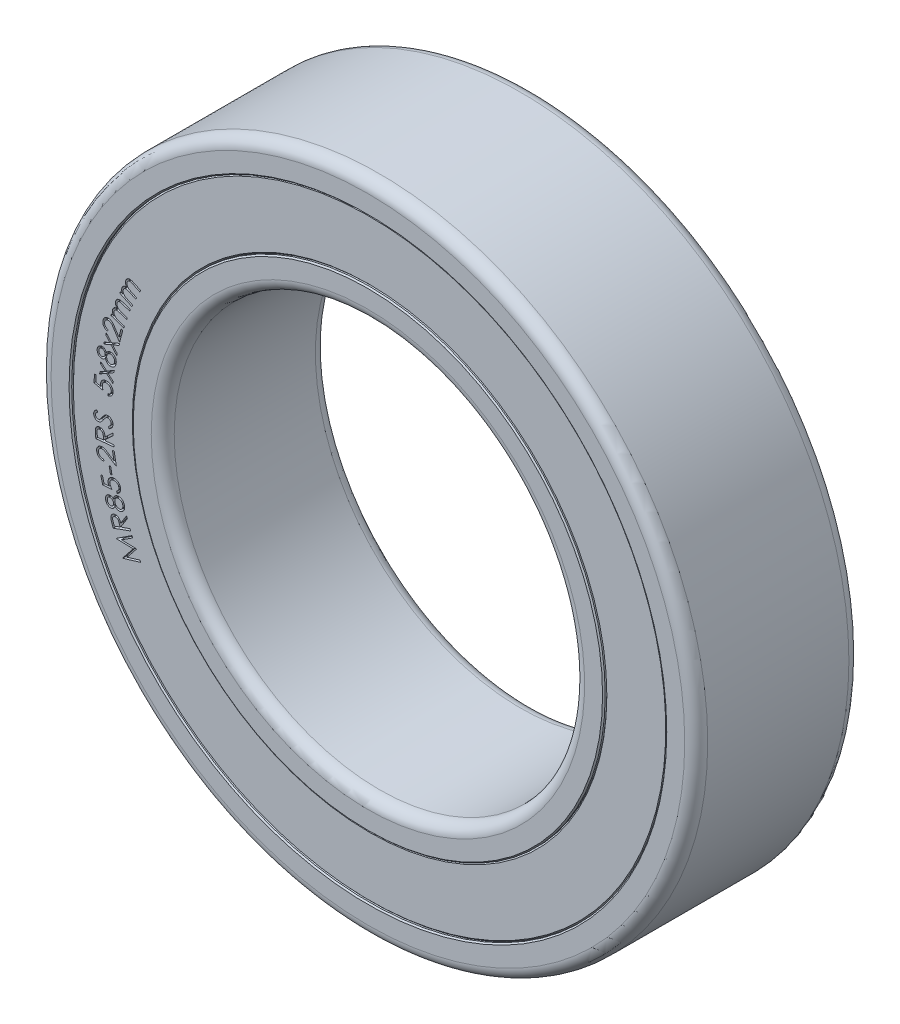
from build123d import *

# Parameters (mm, degrees)
SKETCH_R_INNER_BODY_W          = 2
SKETCH_R_INNER_BODY_H          = 0.375
FILLET_INNER_BODY_R            = 0.14
CHAMFER_INNER_BODY_SIZE        = 0.016
SKETCH_R_OUTER_BODY_W          = 2
SKETCH_R_OUTER_BODY_H          = 0.375
FILLET_OUTER_BODY_R            = 0.14
CHAMFER_OUTER_BODY_SIZE        = 0.016
SKETCH_R_SEAL_FACES_W          = 1.96
SKETCH_R_SEAL_FACES_H          = 0.75
CHAMFER_SEALS_SIZE             = 0.016
CUT_EXTRUDE_SEAL_LABEL_1_DEPTH = 0.05
CUT_EXTRUDE_SEAL_LABEL_2_DEPTH = 0.05


with BuildPart() as part:
    # Sketch R, INNER BODY → Revolve INNER BODY (revolve)
    with BuildSketch(Plane(origin=(0, 0, 0), x_dir=(0, 0, -1), z_dir=(1, 0, 0))):
        with Locations((0, 2.6875)):
            Rectangle(SKETCH_R_INNER_BODY_W, SKETCH_R_INNER_BODY_H)
    revolve(axis=Axis((0, 0, 17.5), (0, 0, -1)))

    # Fillet INNER BODY
    fillet_inner_body_edges = [part.edges().sort_by_distance(p)[0] for p in [
        (0, -2.5, 1),
        (0, -2.5, -1),
    ]]
    fillet(fillet_inner_body_edges, radius=FILLET_INNER_BODY_R)

    # Chamfer INNER BODY
    chamfer_inner_body_edges = [part.edges().sort_by_distance(p)[0] for p in [
        (0, -2.875, -1),
        (0, -2.875, 1),
    ]]
    chamfer(chamfer_inner_body_edges, length=CHAMFER_INNER_BODY_SIZE)


with BuildPart() as body_2:
    # Sketch R, OUTER BODY → Revolve OUTER BODY (revolve)
    with BuildSketch(Plane(origin=(0, 0, 0), x_dir=(0, 0, -1), z_dir=(1, 0, 0))):
        with Locations((0, 3.8125)):
            Rectangle(SKETCH_R_OUTER_BODY_W, SKETCH_R_OUTER_BODY_H)
    revolve(axis=Axis((0, 0, 17.5), (0, 0, -1)))

    # Fillet OUTER BODY
    fillet_outer_body_edges = [body_2.edges().sort_by_distance(p)[0] for p in [
        (0, -4, -1),
        (0, -4, 1),
    ]]
    fillet(fillet_outer_body_edges, radius=FILLET_OUTER_BODY_R)

    # Chamfer OUTER BODY
    chamfer_outer_body_edges = [body_2.edges().sort_by_distance(p)[0] for p in [
        (0, -3.625, 1),
        (0, -3.625, -1),
    ]]
    chamfer(chamfer_outer_body_edges, length=CHAMFER_OUTER_BODY_SIZE)


with BuildPart() as body_3:
    # Sketch R, SEAL FACES → Revolve SEALS (revolve)
    with BuildSketch(Plane(origin=(0, 0, 0), x_dir=(0, 0, -1), z_dir=(1, 0, 0))):
        with Locations((0, 3.25)):
            Rectangle(SKETCH_R_SEAL_FACES_W, SKETCH_R_SEAL_FACES_H)
    revolve(axis=Axis((0, 0, 17.5), (0, 0, -1)))

    # Chamfer SEALS
    chamfer_seals_edges = [body_3.edges().sort_by_distance(p)[0] for p in [
        (0, -2.875, -0.98),
        (0, -3.625, -0.98),
        (0, -3.625, 0.98),
        (0, -2.875, 0.98),
    ]]
    chamfer(chamfer_seals_edges, length=CHAMFER_SEALS_SIZE)

    # Sketch TEXT RADIUS 1 — MANUALLY ASSIGN TEXT AND FONT SIZE (FROM EQUATIONS) → Cut-Extrude SEAL LABEL 1 (cut)
    # profile 1 of 15: a face of its own
    with BuildSketch(Plane.XY.offset(0.98)):
        with BuildLine():
            Line((-3.044405506, 1.278265287), (-3.035526299, 1.297420936))
            Line((-3.035526299, 1.297420936), (-3.009564761, 1.285431754))
            add(Edge.make_bspline(
                [(-3.009564761, 1.285431754), (-3.011076646, 1.288124281), (-3.013973849, 1.293283931), (-3.017281311, 1.30114151), (-3.019807907, 1.308565913), (-3.020623172, 1.313497073), (-3.021013078, 1.315855432)],
                knots=[0, 0, 0, 0, 1.131926805, 2.169094171, 3.124357558, 4, 4, 4, 4], degree=3))
            add(Edge.make_bspline(
                [(-3.021013078, 1.315855432), (-3.021253377, 1.318920036), (-3.021726312, 1.324951524), (-3.020874765, 1.333911136), (-3.019012887, 1.342593907), (-3.016742759, 1.348020255), (-3.015604424, 1.350741249)],
                knots=[0, 0, 0, 0, 1.030612041, 2.028360702, 3.011339274, 4, 4, 4, 4], degree=3))
            add(Edge.make_bspline(
                [(-3.015604424, 1.350741249), (-3.014724081, 1.352518954), (-3.012981404, 1.356037999), (-3.00974739, 1.360940032), (-3.006016473, 1.365413658), (-3.001901098, 1.369516935), (-2.997420704, 1.373054989), (-2.992824726, 1.376154883), (-2.987995606, 1.378482711), (-2.982979157, 1.380313419), (-2.977507502, 1.381483195), (-2.971465235, 1.382089129), (-2.964752232, 1.38211291), (-2.960088589, 1.381727644), (-2.957641684, 1.381525504)],
                knots=[0, 0, 0, 0, 1.008502188, 1.99637424, 2.97890961, 3.967963681, 4.946775902, 5.879532981, 6.78195326, 7.666788205, 8.590324328, 9.620093059, 10.751318303, 12, 12, 12, 12], degree=3))
            add(Edge.make_bspline(
                [(-2.957641684, 1.381525504), (-2.959700948, 1.384468074), (-2.963711623, 1.390199097), (-2.968319158, 1.399383033), (-2.971622556, 1.408662481), (-2.973584223, 1.418004098), (-2.974167146, 1.427293429), (-2.973494476, 1.436361966), (-2.97158299, 1.44520816), (-2.96929616, 1.450754913), (-2.968143487, 1.453550744)],
                knots=[0, 0, 0, 0, 1.125409528, 2.191875118, 3.211407131, 4.207780213, 5.175842474, 6.12104738, 7.052917124, 8, 8, 8, 8], degree=3))
            add(Edge.make_bspline(
                [(-2.968143487, 1.453550744), (-2.966872444, 1.456038296), (-2.964387202, 1.46090215), (-2.959596524, 1.467431992), (-2.953984739, 1.472993137), (-2.94765187, 1.477594119), (-2.940740013, 1.481228236), (-2.933318638, 1.483743115), (-2.925466997, 1.485015487), (-2.918645118, 1.485215226), (-2.912877052, 1.484744541), (-2.908141677, 1.483941518), (-2.903049258, 1.48282649), (-2.897611886, 1.481259111), (-2.891826193, 1.479324765), (-2.885675537, 1.476992818), (-2.879146454, 1.474366397), (-2.874731177, 1.472348997), (-2.872455386, 1.471309158)],
                knots=[0, 0, 0, 0, 1.208784987, 2.36350962, 3.491115065, 4.61855143, 5.742318143, 6.86202489, 7.997343492, 9.17588987, 9.809389301, 10.501715151, 11.254997182, 12.066801631, 12.951857968, 13.897251903, 14.91616859, 16, 16, 16, 16], degree=3))
            Line((-2.872455386, 1.471309158), (-2.790469208, 1.433448581))
            Line((-2.790469208, 1.433448581), (-2.799618847, 1.413706994))
            Line((-2.799618847, 1.413706994), (-2.881605025, 1.451567571))
            add(Edge.make_bspline(
                [(-2.881605025, 1.451567571), (-2.883542222, 1.452440575), (-2.887270659, 1.454120807), (-2.892643909, 1.456510058), (-2.897670875, 1.458398708), (-2.902208486, 1.460128004), (-2.906366494, 1.461389613), (-2.910051508, 1.46250356), (-2.91336662, 1.463105582), (-2.917163417, 1.463624162), (-2.921605043, 1.463549657), (-2.926743579, 1.462711583), (-2.931690992, 1.460932194), (-2.936473096, 1.458482914), (-2.940905991, 1.455202793), (-2.944920189, 1.451205693), (-2.948363475, 1.446417719), (-2.950176409, 1.442850337), (-2.951106227, 1.441020696)],
                knots=[0, 0, 0, 0, 1.260116527, 2.425289154, 3.485827448, 4.444142058, 5.303550506, 6.062303239, 6.724531287, 7.299161021, 8.332673098, 9.344766128, 10.373196842, 11.437135085, 12.520553344, 13.6293173, 14.784123204, 16, 16, 16, 16], degree=3))
            add(Edge.make_bspline(
                [(-2.951106227, 1.441020696), (-2.952067586, 1.438671794), (-2.953972479, 1.434017542), (-2.955502891, 1.426610291), (-2.955804865, 1.419034677), (-2.954938828, 1.411408918), (-2.952963254, 1.403915979), (-2.949868477, 1.396803589), (-2.945753208, 1.390133836), (-2.941450035, 1.384976035), (-2.937245813, 1.381036679), (-2.933424328, 1.377943055), (-2.928917489, 1.374807599), (-2.923822716, 1.371502744), (-2.918040566, 1.368132048), (-2.911582897, 1.364692272), (-2.904520165, 1.361052792), (-2.899523006, 1.358744903), (-2.896929544, 1.357547138)],
                knots=[0, 0, 0, 0, 1.078647653, 2.137296466, 3.199898173, 4.293907982, 5.392227613, 6.486461726, 7.583365276, 8.718315344, 9.333617315, 10.033803875, 10.809247219, 11.669630427, 12.618435043, 13.657152823, 14.78409191, 16, 16, 16, 16], degree=3))
            Line((-2.896929544, 1.357547138), (-2.838110434, 1.330368653))
            Line((-2.838110434, 1.330368653), (-2.84698964, 1.311167932))
            Line((-2.84698964, 1.311167932), (-2.923882669, 1.346684758))
            add(Edge.make_bspline(
                [(-2.923882669, 1.346684758), (-2.92605819, 1.347682698), (-2.930227607, 1.349595263), (-2.936264656, 1.352242436), (-2.941852481, 1.354413374), (-2.946898939, 1.356340178), (-2.951453225, 1.357878318), (-2.955523454, 1.359073424), (-2.959105236, 1.359896509), (-2.963176559, 1.360509735), (-2.967881063, 1.360619794), (-2.973303047, 1.359909622), (-2.978528746, 1.358281267), (-2.983519045, 1.355866787), (-2.988112845, 1.352617424), (-2.992205255, 1.34860513), (-2.995743283, 1.343861474), (-2.997552973, 1.340270269), (-2.99847702, 1.338436561)],
                knots=[0, 0, 0, 0, 1.333425133, 2.555528307, 3.671475151, 4.672635723, 5.564597174, 6.348681151, 7.035003474, 7.610270149, 8.640059799, 9.645026614, 10.64313876, 11.676290248, 12.721273839, 13.762967403, 14.857746723, 16, 16, 16, 16], degree=3))
            add(Edge.make_bspline(
                [(-2.99847702, 1.338436561), (-2.999392674, 1.336192051), (-3.001219311, 1.331714483), (-3.002635879, 1.324528937), (-3.002934641, 1.317116379), (-3.002158905, 1.309574807), (-3.000345867, 1.30211978), (-2.997374948, 1.295014265), (-2.993339956, 1.28837111), (-2.989170075, 1.28319428), (-2.985142312, 1.279239215), (-2.981548649, 1.276209068), (-2.977430785, 1.273129688), (-2.972747575, 1.270084954), (-2.967592758, 1.266930465), (-2.961873007, 1.263769128), (-2.955624722, 1.2605881), (-2.951246753, 1.25851278), (-2.948987837, 1.25744197)],
                knots=[0, 0, 0, 0, 1.083885002, 2.162239728, 3.260261739, 4.396697242, 5.547470443, 6.684862106, 7.832146644, 9.018826846, 9.651781, 10.35841241, 11.122956156, 11.953602306, 12.859673542, 13.82974629, 14.88020698, 16, 16, 16, 16], degree=3))
            Line((-2.948987837, 1.25744197), (-2.885346011, 1.228054951))
            Line((-2.885346011, 1.228054951), (-2.894225217, 1.208899302))
            Line((-2.894225217, 1.208899302), (-3.044405506, 1.278265287))
        make_face()
    # profile 2 of 15: a face of its own
    with BuildSketch(Plane.XY.offset(0.98)):
        with BuildLine():
            Line((-3.150508558, 0.988170016), (-3.143747741, 1.008136963))
            Line((-3.143747741, 1.008136963), (-3.116749544, 0.998987323))
            add(Edge.make_bspline(
                [(-3.116749544, 0.998987323), (-3.11852766, 1.001509836), (-3.121923082, 1.006326724), (-3.126021957, 1.013765227), (-3.129306041, 1.02083793), (-3.130630498, 1.025634058), (-3.131262765, 1.027923622)],
                knots=[0, 0, 0, 0, 1.136158392, 2.169562812, 3.126190424, 4, 4, 4, 4], degree=3))
            add(Edge.make_bspline(
                [(-3.131262765, 1.027923622), (-3.131809338, 1.030933967), (-3.132888205, 1.036876011), (-3.133086906, 1.045844613), (-3.13209343, 1.054647982), (-3.130430909, 1.060259001), (-3.129595096, 1.063079872)],
                knots=[0, 0, 0, 0, 1.029344983, 2.031797489, 3.010510455, 4, 4, 4, 4], degree=3))
            add(Edge.make_bspline(
                [(-3.129595096, 1.063079872), (-3.128916349, 1.064931366), (-3.127566059, 1.068614701), (-3.124797519, 1.07378647), (-3.121666275, 1.078708778), (-3.117960339, 1.083173146), (-3.113942005, 1.087215295), (-3.109659545, 1.090705155), (-3.10515242, 1.093580511), (-3.100346102, 1.09589367), (-3.09506664, 1.097670444), (-3.0891385, 1.09890957), (-3.082499255, 1.099667478), (-3.077824437, 1.099763368), (-3.075373342, 1.099813646)],
                knots=[0, 0, 0, 0, 1.004205539, 1.997750388, 2.983558871, 3.974117121, 4.949033681, 5.885708032, 6.784536688, 7.668423865, 8.598561152, 9.617152993, 10.750628567, 12, 12, 12, 12], degree=3))
            add(Edge.make_bspline(
                [(-3.075373342, 1.099813646), (-3.077705641, 1.102528294), (-3.082247486, 1.107814714), (-3.087844247, 1.116395238), (-3.092084071, 1.125249095), (-3.094988778, 1.134304211), (-3.096588602, 1.143424406), (-3.096842726, 1.152493098), (-3.095922026, 1.161476178), (-3.094215462, 1.167231437), (-3.093357116, 1.170126146)],
                knots=[0, 0, 0, 0, 1.125108559, 2.191000355, 3.212187059, 4.204770988, 5.173812026, 6.114873576, 7.051842603, 8, 8, 8, 8], degree=3))
            add(Edge.make_bspline(
                [(-3.093357116, 1.170126146), (-3.092359627, 1.172726241), (-3.090408564, 1.177811967), (-3.086353544, 1.184798117), (-3.081375473, 1.190888195), (-3.075638021, 1.19615507), (-3.069157, 1.200449478), (-3.0620823, 1.203738207), (-3.054435143, 1.205835068), (-3.047697045, 1.206764779), (-3.041927426, 1.206862119), (-3.037138934, 1.206633586), (-3.031961494, 1.206036953), (-3.026404032, 1.205060523), (-3.020445215, 1.203804475), (-3.014088838, 1.202166275), (-3.007343957, 1.20018239), (-3.002743063, 1.198669693), (-3.000373342, 1.197890569)],
                knots=[0, 0, 0, 0, 1.208707548, 2.364203308, 3.491831008, 4.614686702, 5.735433994, 6.857055519, 7.989604458, 9.168594578, 9.801956847, 10.494707013, 11.250222386, 12.064799989, 12.945685124, 13.895678062, 14.916155053, 16, 16, 16, 16], degree=3))
            Line((-3.000373342, 1.197890569), (-2.915051827, 1.168999343))
            Line((-2.915051827, 1.168999343), (-2.922038005, 1.148446458))
            Line((-2.922038005, 1.148446458), (-3.00735952, 1.177337684))
            add(Edge.make_bspline(
                [(-3.00735952, 1.177337684), (-3.009369574, 1.17800858), (-3.013241598, 1.179300946), (-3.018851735, 1.180999291), (-3.024003295, 1.182451588), (-3.028698183, 1.183655375), (-3.032960651, 1.184497722), (-3.036762925, 1.185104318), (-3.040104732, 1.185438584), (-3.043925321, 1.185510689), (-3.048322846, 1.185010865), (-3.053327914, 1.183584814), (-3.058081836, 1.181350826), (-3.062552691, 1.178365096), (-3.066616914, 1.174675156), (-3.070130127, 1.170259363), (-3.073095585, 1.165197842), (-3.074482687, 1.161452348), (-3.075193053, 1.159534198)],
                knots=[0, 0, 0, 0, 1.259511045, 2.426231453, 3.483625259, 4.440952823, 5.306125967, 6.065195711, 6.728982946, 7.300587575, 8.334105236, 9.346101917, 10.380853445, 11.443400988, 12.530691149, 13.629690394, 14.786112374, 16, 16, 16, 16], degree=3))
            add(Edge.make_bspline(
                [(-3.075193053, 1.159534198), (-3.075905886, 1.157102469), (-3.077320753, 1.152275851), (-3.077990118, 1.144757486), (-3.077552996, 1.137199008), (-3.075849107, 1.12972035), (-3.073141142, 1.122469927), (-3.069299736, 1.115742773), (-3.06449171, 1.109598248), (-3.059710916, 1.104898602), (-3.055106541, 1.101470333), (-3.050979587, 1.098809225), (-3.046206373, 1.09612078), (-3.040764252, 1.093425237), (-3.034682515, 1.090672088), (-3.027902402, 1.087944476), (-3.020476956, 1.085153321), (-3.015281445, 1.083350476), (-3.012587885, 1.082415809)],
                knots=[0, 0, 0, 0, 1.078335694, 2.140334348, 3.199314415, 4.29511119, 5.39807548, 6.488277492, 7.583924445, 8.716555053, 9.334124311, 10.028905878, 10.809213973, 11.668710157, 12.617752059, 13.655118813, 14.784320031, 16, 16, 16, 16], degree=3))
            Line((-3.012587885, 1.082415809), (-2.951379952, 1.061682636))
            Line((-2.951379952, 1.061682636), (-2.95814077, 1.041715689))
            Line((-2.95814077, 1.041715689), (-3.038143774, 1.06880403))
            add(Edge.make_bspline(
                [(-3.038143774, 1.06880403), (-3.0404096, 1.069563628), (-3.044748039, 1.071018051), (-3.051024862, 1.07297479), (-3.056791181, 1.074572105), (-3.062002099, 1.075978801), (-3.066711918, 1.076922719), (-3.070857727, 1.077762125), (-3.074508573, 1.078149688), (-3.078607892, 1.078363578), (-3.083295306, 1.077949504), (-3.088619975, 1.076715546), (-3.093644244, 1.074538463), (-3.098317935, 1.071603297), (-3.102606387, 1.067974652), (-3.106155488, 1.06350473), (-3.109222423, 1.058453767), (-3.110620573, 1.054694899), (-3.11134089, 1.052758357)],
                knots=[0, 0, 0, 0, 1.333651183, 2.553578173, 3.668423304, 4.673016277, 5.56429314, 6.348718951, 7.032036928, 7.611108974, 8.637439612, 9.646117945, 10.649065105, 11.677345999, 12.717724732, 13.766616271, 14.8493767, 16, 16, 16, 16], degree=3))
            add(Edge.make_bspline(
                [(-3.11134089, 1.052758357), (-3.112020738, 1.050431117), (-3.113374776, 1.04579601), (-3.114000162, 1.038519532), (-3.113539308, 1.031140023), (-3.111958394, 1.023744148), (-3.109307189, 1.016547045), (-3.105635108, 1.009789016), (-3.100970195, 1.003568737), (-3.096239439, 0.998901693), (-3.091843359, 0.995383253), (-3.087950773, 0.992793348), (-3.083541087, 0.990206639), (-3.078589677, 0.987669968), (-3.073120353, 0.985093758), (-3.067126298, 0.982527673), (-3.060586347, 0.980002583), (-3.056012889, 0.978434026), (-3.053648582, 0.977623141)],
                knots=[0, 0, 0, 0, 1.085884764, 2.162730317, 3.257122796, 4.394418442, 5.544257109, 6.687771888, 7.834026675, 9.0212163, 9.659352715, 10.358773246, 11.117376649, 11.952733972, 12.854590413, 13.83025342, 14.878321981, 16, 16, 16, 16], degree=3))
            Line((-3.053648582, 0.977623141), (-2.987437645, 0.955222299))
            Line((-2.987437645, 0.955222299), (-2.994198462, 0.935255352))
            Line((-2.994198462, 0.935255352), (-3.150508558, 0.988170016))
        make_face()
    # profile 3 of 15: a face of its own
    with BuildSketch(Plane.XY.offset(0.98)):
        with BuildLine():
            Line((-3.187704275, 0.820212369), (-3.193112929, 0.799343979))
            add(Edge.make_bspline(
                [(-3.193112929, 0.799343979), (-3.195714395, 0.80015229), (-3.20081748, 0.801737886), (-3.208041178, 0.804891368), (-3.214771804, 0.808494348), (-3.2209593, 0.812667852), (-3.226682967, 0.817309373), (-3.231844667, 0.822539962), (-3.236496588, 0.828274608), (-3.240585975, 0.834480739), (-3.244035179, 0.841020744), (-3.246796931, 0.847753391), (-3.248855781, 0.854619237), (-3.250162063, 0.861630319), (-3.250745194, 0.868788685), (-3.250615394, 0.876068172), (-3.249695401, 0.88347704), (-3.248579427, 0.888384682), (-3.248010766, 0.890885446)],
                knots=[0, 0, 0, 0, 1.099038301, 2.155893724, 3.176319575, 4.177253219, 5.164344994, 6.146504829, 7.138300033, 8.140922956, 9.142077102, 10.118621061, 11.074297589, 12.030743708, 12.992311061, 13.969005698, 14.965075941, 16, 16, 16, 16], degree=3))
            add(Edge.make_bspline(
                [(-3.248010766, 0.890885446), (-3.247319387, 0.893319154), (-3.245968118, 0.898075732), (-3.243223659, 0.904826335), (-3.240029761, 0.911092294), (-3.236285191, 0.916849341), (-3.231978099, 0.922037638), (-3.22720587, 0.926739159), (-3.221895181, 0.930903817), (-3.216121099, 0.934508716), (-3.21007539, 0.937547167), (-3.20391283, 0.940011538), (-3.19766336, 0.9418271), (-3.191337609, 0.942996075), (-3.184949859, 0.943565192), (-3.178507682, 0.943379584), (-3.171988707, 0.942717502), (-3.167698638, 0.941700373), (-3.165528794, 0.941185927)],
                knots=[0, 0, 0, 0, 1.124987536, 2.198739624, 3.23617028, 4.250360795, 5.247488445, 6.230716279, 7.225668041, 8.243904078, 9.2543646, 10.232534667, 11.193002174, 12.144870538, 13.090828886, 14.040276475, 15.008805546, 16, 16, 16, 16], degree=3))
            add(Edge.make_bspline(
                [(-3.165528794, 0.941185927), (-3.162508317, 0.940307876), (-3.156514631, 0.938565515), (-3.148100469, 0.934488366), (-3.140206788, 0.929521417), (-3.134156595, 0.924408677), (-3.129433637, 0.919645562), (-3.12560211, 0.915472528), (-3.121623216, 0.910607563), (-3.11731705, 0.905223596), (-3.112884068, 0.899161879), (-3.108189105, 0.89251514), (-3.103221465, 0.885283083), (-3.099935515, 0.880182144), (-3.098236126, 0.8775441)],
                knots=[0, 0, 0, 0, 1.189418866, 2.360223516, 3.526720285, 4.714218612, 5.349916986, 6.066806454, 6.858712798, 7.729573737, 8.677545223, 9.702132608, 10.811615933, 12, 12, 12, 12], degree=3))
            Line((-3.098236126, 0.8775441), (-3.053840093, 0.80831333))
            Line((-3.053840093, 0.80831333), (-3.027878554, 0.908734003))
            Line((-3.027878554, 0.908734003), (-3.006874948, 0.903280278))
            Line((-3.006874948, 0.903280278), (-3.04505103, 0.755533883))
            Line((-3.04505103, 0.755533883), (-3.113335285, 0.861859003))
            add(Edge.make_bspline(
                [(-3.113335285, 0.861859003), (-3.114979372, 0.864448653), (-3.118139951, 0.869426973), (-3.122826467, 0.876505695), (-3.127238042, 0.882901052), (-3.131351574, 0.888632743), (-3.135115417, 0.893740914), (-3.138624451, 0.898168586), (-3.141860434, 0.901911048), (-3.145729154, 0.905989845), (-3.150606642, 0.910265079), (-3.156831218, 0.914499362), (-3.163541133, 0.917755612), (-3.168255965, 0.919191391), (-3.170621944, 0.919911888)],
                knots=[0, 0, 0, 0, 1.320441267, 2.538405058, 3.654263809, 4.664721851, 5.575349837, 6.385411698, 7.096039175, 7.70442837, 8.804430686, 9.880696134, 10.936499401, 12, 12, 12, 12], degree=3))
            add(Edge.make_bspline(
                [(-3.170621944, 0.919911888), (-3.17213383, 0.920256966), (-3.17512013, 0.920938568), (-3.179653717, 0.921437029), (-3.184139503, 0.921425317), (-3.188585061, 0.920988455), (-3.192963528, 0.920028097), (-3.197287399, 0.918602908), (-3.201586699, 0.916760283), (-3.205764916, 0.914422664), (-3.209768598, 0.911751491), (-3.213418284, 0.908711919), (-3.216749793, 0.905426686), (-3.219635557, 0.901766083), (-3.222223883, 0.897864159), (-3.224375588, 0.8936123), (-3.22626188, 0.889123339), (-3.227145795, 0.885953883), (-3.227593097, 0.884349989)],
                knots=[0, 0, 0, 0, 0.996140761, 1.967591531, 2.923561564, 3.874789241, 4.833145976, 5.798096097, 6.797227717, 7.834545895, 8.871009777, 9.886066292, 10.882955609, 11.872239632, 12.876583824, 13.887175294, 14.930811401, 16, 16, 16, 16], degree=3))
            add(Edge.make_bspline(
                [(-3.227593097, 0.884349989), (-3.22800696, 0.882629208), (-3.228817335, 0.879259791), (-3.229364431, 0.874162698), (-3.229530687, 0.869200895), (-3.229164545, 0.864335867), (-3.228303473, 0.859578056), (-3.226950603, 0.854922664), (-3.225079175, 0.850381646), (-3.222731948, 0.845979618), (-3.219962382, 0.841739223), (-3.216676697, 0.837799666), (-3.212960251, 0.834116766), (-3.208767523, 0.830771174), (-3.204166223, 0.827660191), (-3.199099288, 0.824887869), (-3.193590489, 0.822344912), (-3.189698913, 0.820935015), (-3.187704275, 0.820212369)],
                knots=[0, 0, 0, 0, 1.008980663, 1.975658986, 2.91909423, 3.83901878, 4.753855411, 5.673620141, 6.600232244, 7.551388131, 8.516811002, 9.485008902, 10.473194991, 11.497503553, 12.541394923, 13.638936381, 14.789830445, 16, 16, 16, 16], degree=3))
        make_face()
    # profile 4 of 15: a face of its own
    with BuildSketch(Plane.XY.offset(0.98)):
        Polygon((-3.239437561, 0.641786291), (-3.233713403, 0.666621027), (-3.164257273, 0.695467181), (-3.214016888, 0.751807325), (-3.20829273, 0.776687133), (-3.144560759, 0.704030883), (-3.045762682, 0.746488815), (-3.051576985, 0.721338575), (-3.130543331, 0.687669705), (-3.074158114, 0.623577157), (-3.079837201, 0.598877638), (-3.150239845, 0.679331364), align=None)
    # profile 5 of 15: a face of its own
    with BuildSketch(Plane.XY.offset(0.98)):
        with BuildLine():
            add(Edge.make_bspline(
                [(-3.207722213, 0.568128468), (-3.206491344, 0.56976371), (-3.204087214, 0.57295766), (-3.200293959, 0.577425736), (-3.196460201, 0.58147423), (-3.192647796, 0.585162125), (-3.188735877, 0.588347112), (-3.184882391, 0.591227924), (-3.18093447, 0.59362374), (-3.175678902, 0.596246285), (-3.16891314, 0.598723573), (-3.160458297, 0.60033496), (-3.151726106, 0.600759533), (-3.145907325, 0.599953097), (-3.142953583, 0.599543733)],
                knots=[0, 0, 0, 0, 0.964411829, 1.883687147, 2.76019477, 3.591526953, 4.381138105, 5.135952504, 5.857246454, 6.553861956, 7.90222017, 9.236657086, 10.597266119, 12, 12, 12, 12], degree=3))
            add(Edge.make_bspline(
                [(-3.142953583, 0.599543733), (-3.140870433, 0.599132831), (-3.136762503, 0.598322541), (-3.130814776, 0.596423741), (-3.12512813, 0.594106095), (-3.119746323, 0.591231567), (-3.114619472, 0.587935425), (-3.109786117, 0.584138641), (-3.10524292, 0.579823726), (-3.102483173, 0.576640937), (-3.101081588, 0.575024502)],
                knots=[0, 0, 0, 0, 1.026816901, 2.024862481, 3.015944804, 3.994951761, 4.973094347, 5.962174348, 6.965054897, 8, 8, 8, 8], degree=3))
            add(Edge.make_bspline(
                [(-3.101081588, 0.575024502), (-3.099477486, 0.572959835), (-3.096286714, 0.568852938), (-3.092516717, 0.562017963), (-3.089570173, 0.554798199), (-3.087433132, 0.547178658), (-3.086194409, 0.539144743), (-3.085751999, 0.530706141), (-3.086148363, 0.521840824), (-3.087081172, 0.515853178), (-3.087559954, 0.512779911)],
                knots=[0, 0, 0, 0, 0.952024089, 1.893702452, 2.834583957, 3.790131161, 4.771698734, 5.791978954, 6.866693697, 8, 8, 8, 8], degree=3))
            add(Edge.make_bspline(
                [(-3.087559954, 0.512779911), (-3.088143886, 0.509839387), (-3.089277951, 0.504128551), (-3.091710914, 0.495971454), (-3.094759106, 0.488508829), (-3.098232763, 0.481650005), (-3.10237986, 0.47549975), (-3.107098505, 0.47004239), (-3.112282222, 0.465135874), (-3.118080374, 0.461106557), (-3.124084209, 0.457654877), (-3.130196058, 0.45479949), (-3.136333781, 0.452541485), (-3.142494287, 0.450842859), (-3.148687091, 0.449798843), (-3.154906111, 0.449411478), (-3.161162201, 0.449547792), (-3.16529876, 0.450174517), (-3.16738267, 0.450490247)],
                knots=[0, 0, 0, 0, 1.268639439, 2.463844573, 3.596459307, 4.677377639, 5.712826829, 6.727579744, 7.72660502, 8.725448079, 9.708370675, 10.655860352, 11.577423242, 12.473821453, 13.357334256, 14.230531534, 15.108579304, 16, 16, 16, 16], degree=3))
            add(Edge.make_bspline(
                [(-3.16738267, 0.450490247), (-3.168891084, 0.450780363), (-3.171875712, 0.451354403), (-3.176216932, 0.452653822), (-3.180407658, 0.454173808), (-3.184442631, 0.455973674), (-3.188275168, 0.458103923), (-3.191940071, 0.460512704), (-3.195474377, 0.463163339), (-3.198812047, 0.466156831), (-3.202002988, 0.469464374), (-3.204976121, 0.473183442), (-3.207777117, 0.477298229), (-3.21036733, 0.481824892), (-3.212867316, 0.486699056), (-3.215153383, 0.491988563), (-3.217273508, 0.497660778), (-3.218498866, 0.501610542), (-3.219125458, 0.503630271)],
                knots=[0, 0, 0, 0, 0.936465325, 1.85294039, 2.760435831, 3.654691982, 4.544853036, 5.431989537, 6.328309647, 7.237053714, 8.16396302, 9.128659144, 10.137822626, 11.19729317, 12.308044313, 13.477762373, 14.710242457, 16, 16, 16, 16], degree=3))
            add(Edge.make_bspline(
                [(-3.219125458, 0.503630271), (-3.220996419, 0.501329741), (-3.224619496, 0.496874813), (-3.230765148, 0.491141369), (-3.23724353, 0.486489755), (-3.244013351, 0.482949888), (-3.25097978, 0.480538678), (-3.258004001, 0.479179945), (-3.265106806, 0.478804139), (-3.269775909, 0.47942765), (-3.272130266, 0.47974205)],
                knots=[0, 0, 0, 0, 1.160505477, 2.247294604, 3.281032475, 4.276032814, 5.228963927, 6.158099977, 7.071236798, 8, 8, 8, 8], degree=3))
            add(Edge.make_bspline(
                [(-3.272130266, 0.47974205), (-3.274495394, 0.480271762), (-3.27924983, 0.481336601), (-3.286081196, 0.484267451), (-3.292607706, 0.488242311), (-3.298791804, 0.493173695), (-3.304405788, 0.498982001), (-3.309163818, 0.505609758), (-3.31314159, 0.512871828), (-3.316099322, 0.520789517), (-3.318203614, 0.529086634), (-3.319154364, 0.537630196), (-3.319219477, 0.546306468), (-3.318388688, 0.552058798), (-3.317968607, 0.554967411)],
                knots=[0, 0, 0, 0, 0.89282296, 1.794773282, 2.7274807, 3.705846013, 4.705667587, 5.698161537, 6.707832904, 7.75186496, 8.808712371, 9.85807389, 10.916955043, 12, 12, 12, 12], degree=3))
            add(Edge.make_bspline(
                [(-3.317968607, 0.554967411), (-3.317380859, 0.557767202), (-3.31621901, 0.563301768), (-3.313209303, 0.571187807), (-3.309374084, 0.578610488), (-3.304585066, 0.585433329), (-3.299094355, 0.591583075), (-3.292946012, 0.596879464), (-3.286214436, 0.60124785), (-3.278987102, 0.604640345), (-3.271506154, 0.607081526), (-3.263943162, 0.608452752), (-3.256371866, 0.608785836), (-3.251407003, 0.608093783), (-3.248918127, 0.607746858)],
                knots=[0, 0, 0, 0, 1.066877825, 2.108980028, 3.140349499, 4.180017357, 5.212972614, 6.21157802, 7.201302396, 8.200159936, 9.184862523, 10.131277051, 11.063212996, 12, 12, 12, 12], degree=3))
            add(Edge.make_bspline(
                [(-3.248918127, 0.607746858), (-3.246509134, 0.607231981), (-3.241783007, 0.60622186), (-3.23511851, 0.603506592), (-3.229057452, 0.599865112), (-3.223594094, 0.595282902), (-3.218687047, 0.589824574), (-3.214412427, 0.583427476), (-3.210616556, 0.576171546), (-3.208710448, 0.570874671), (-3.207722213, 0.568128468)],
                knots=[0, 0, 0, 0, 0.979190144, 1.921042879, 2.849352428, 3.78363521, 4.749250126, 5.761193427, 6.839274954, 8, 8, 8, 8], degree=3))
        make_face()
        with BuildLine():
            add(Edge.make_bspline(
                [(-3.296829785, 0.550189766), (-3.297070383, 0.548705624), (-3.297542303, 0.545794559), (-3.297722501, 0.54146266), (-3.297675954, 0.53726973), (-3.297163235, 0.533210646), (-3.296306422, 0.529273294), (-3.295099647, 0.525455122), (-3.293442097, 0.521813622), (-3.291545299, 0.51829959), (-3.289276371, 0.515089675), (-3.286861315, 0.512123738), (-3.284189436, 0.509567547), (-3.281362703, 0.507318365), (-3.278333741, 0.505407247), (-3.275085288, 0.503895554), (-3.271664039, 0.50267826), (-3.269283419, 0.502203724), (-3.268073776, 0.501962603)],
                knots=[0, 0, 0, 0, 1.153312226, 2.262158994, 3.323616163, 4.369478139, 5.396663079, 6.414413659, 7.436859767, 8.464238986, 9.475366034, 10.450112269, 11.396392096, 12.307937428, 13.220066429, 14.138518883, 15.054142085, 16, 16, 16, 16], degree=3))
            add(Edge.make_bspline(
                [(-3.268073776, 0.501962603), (-3.266859426, 0.501778452), (-3.264439875, 0.501411537), (-3.260777845, 0.501466764), (-3.257129798, 0.501791407), (-3.253507997, 0.502636501), (-3.249897678, 0.503852012), (-3.246299137, 0.505492098), (-3.242763789, 0.507584373), (-3.23926758, 0.509989608), (-3.23596451, 0.51271735), (-3.232920807, 0.515681879), (-3.230288691, 0.518907459), (-3.227885349, 0.522234499), (-3.225961485, 0.525847163), (-3.224329514, 0.52962541), (-3.22306071, 0.533615792), (-3.222482562, 0.53636194), (-3.222190362, 0.537749863)],
                knots=[0, 0, 0, 0, 0.91747144, 1.828029947, 2.73183239, 3.65363236, 4.60278737, 5.578725069, 6.606381722, 7.672840546, 8.750907988, 9.808143533, 10.845895588, 11.862611192, 12.873718147, 13.90106733, 14.939184641, 16, 16, 16, 16], degree=3))
            add(Edge.make_bspline(
                [(-3.222190362, 0.537749863), (-3.221946945, 0.539564406), (-3.22146347, 0.543168449), (-3.221592005, 0.548624476), (-3.222341746, 0.554036487), (-3.223859792, 0.559337375), (-3.225921328, 0.564434015), (-3.228671423, 0.5691506), (-3.232011616, 0.573396197), (-3.235896801, 0.577113593), (-3.240087301, 0.580294529), (-3.244489572, 0.582842844), (-3.249030099, 0.584756929), (-3.252179647, 0.585452133), (-3.253740843, 0.585796738)],
                knots=[0, 0, 0, 0, 1.035547492, 2.056802145, 3.079686216, 4.122306655, 5.171572906, 6.185891178, 7.203879172, 8.22090648, 9.223304699, 10.176381338, 11.096052363, 12, 12, 12, 12], degree=3))
            add(Edge.make_bspline(
                [(-3.253740843, 0.585796738), (-3.255948575, 0.586065468), (-3.260380235, 0.586604899), (-3.267142821, 0.585521873), (-3.273828787, 0.583157146), (-3.279231518, 0.580141997), (-3.283304578, 0.577012891), (-3.286189053, 0.574300409), (-3.288710869, 0.571162976), (-3.290924205, 0.567659024), (-3.292862232, 0.563806703), (-3.294531327, 0.559602889), (-3.295892958, 0.555032593), (-3.296511763, 0.551833748), (-3.296829785, 0.550189766)],
                knots=[0, 0, 0, 0, 1.277894766, 2.565164402, 3.90582418, 5.357448492, 6.111694756, 6.865891201, 7.636255765, 8.427458408, 9.253238893, 10.120911211, 11.034280237, 12, 12, 12, 12], degree=3))
        make_face(mode=Mode.SUBTRACT)
        with BuildLine():
            add(Edge.make_bspline(
                [(-3.202268487, 0.534549742), (-3.202563899, 0.53269082), (-3.203145148, 0.529033227), (-3.203317732, 0.523551734), (-3.203143578, 0.51820679), (-3.202340529, 0.513021819), (-3.201148065, 0.507964526), (-3.199357966, 0.503082998), (-3.19710862, 0.498336192), (-3.194365082, 0.493824576), (-3.191272042, 0.489602046), (-3.187908593, 0.485785035), (-3.184321906, 0.482390814), (-3.180457294, 0.479515962), (-3.176401081, 0.476986326), (-3.172050194, 0.475036436), (-3.167501594, 0.473448949), (-3.164342401, 0.472809653), (-3.162740242, 0.47248544)],
                knots=[0, 0, 0, 0, 1.103969108, 2.17215678, 3.213906178, 4.23928343, 5.246903889, 6.259722768, 7.285517249, 8.326257942, 9.354779194, 10.354648612, 11.309421187, 12.24792084, 13.17826092, 14.109729267, 15.041364649, 16, 16, 16, 16], degree=3))
            add(Edge.make_bspline(
                [(-3.162740242, 0.47248544), (-3.160731158, 0.472194511), (-3.15672407, 0.471614259), (-3.150631707, 0.471917984), (-3.144580888, 0.4729405), (-3.138652252, 0.474843445), (-3.132955451, 0.477529964), (-3.12771218, 0.481071054), (-3.122964242, 0.485366644), (-3.118764221, 0.490411626), (-3.115127274, 0.496121155), (-3.112141326, 0.502471411), (-3.109771492, 0.509377448), (-3.108793312, 0.514253116), (-3.108293127, 0.516746257)],
                knots=[0, 0, 0, 0, 0.928863122, 1.852603139, 2.782410941, 3.736651105, 4.698025875, 5.660978934, 6.626687792, 7.624254742, 8.661926711, 9.721927466, 10.835122401, 12, 12, 12, 12], degree=3))
            add(Edge.make_bspline(
                [(-3.108293127, 0.516746257), (-3.10798904, 0.5187105), (-3.107394749, 0.522549315), (-3.107089129, 0.528237229), (-3.107257218, 0.533698417), (-3.107925497, 0.538923735), (-3.109096087, 0.543947487), (-3.110822764, 0.548710361), (-3.112992084, 0.553268369), (-3.115658738, 0.557518851), (-3.118659307, 0.561473814), (-3.121943975, 0.565026919), (-3.125441853, 0.568169915), (-3.129161496, 0.57090468), (-3.133143491, 0.57320067), (-3.137336076, 0.575098897), (-3.141762741, 0.576572738), (-3.144823612, 0.577189862), (-3.146379064, 0.577503468)],
                knots=[0, 0, 0, 0, 1.189629678, 2.324950734, 3.405143735, 4.457439671, 5.4743354, 6.487403403, 7.485338124, 8.491431256, 9.486482529, 10.45419347, 11.384375242, 12.298494734, 13.213543457, 14.131594665, 15.050527089, 16, 16, 16, 16], degree=3))
            add(Edge.make_bspline(
                [(-3.146379064, 0.577503468), (-3.147892987, 0.577738926), (-3.150893653, 0.578205614), (-3.155448857, 0.578195965), (-3.159950958, 0.577816128), (-3.164419248, 0.576911368), (-3.168796726, 0.575433224), (-3.173159745, 0.573526424), (-3.177484714, 0.571141479), (-3.18167055, 0.568260838), (-3.185676175, 0.565063893), (-3.189268397, 0.561486181), (-3.192502792, 0.557686433), (-3.195319162, 0.553598892), (-3.197707966, 0.549233932), (-3.199643374, 0.544570369), (-3.201253903, 0.539681756), (-3.201928127, 0.536271367), (-3.202268487, 0.534549742)],
                knots=[0, 0, 0, 0, 0.941173126, 1.865449502, 2.793415251, 3.717830245, 4.661857957, 5.630317114, 6.643814615, 7.694839472, 8.752871104, 9.79200343, 10.808530574, 11.818608864, 12.840207255, 13.863267847, 14.921339846, 16, 16, 16, 16], degree=3))
        make_face(mode=Mode.SUBTRACT)
    # profile 6 of 15: a face of its own
    with BuildSketch(Plane.XY.offset(0.98)):
        Polygon((-3.288397551, 0.302123284), (-3.285828441, 0.327453813), (-3.220654162, 0.36468338), (-3.277039378, 0.414262707), (-3.274470268, 0.439593236), (-3.202219667, 0.375635904), (-3.109776758, 0.430037947), (-3.112345869, 0.404391914), (-3.18630921, 0.361212827), (-3.122487095, 0.304782539), (-3.125011133, 0.279632298), (-3.204788777, 0.350440592), align=None)
    # profile 7 of 15: a face of its own
    with BuildSketch(Plane.XY.offset(0.98)):
        with BuildLine():
            Line((-3.351673968, 0.272480623), (-3.330354857, 0.271398893))
            Line((-3.330354857, 0.271398893), (-3.334366275, 0.19166632))
            Line((-3.334366275, 0.19166632), (-3.273969641, 0.177468604))
            add(Edge.make_bspline(
                [(-3.273969641, 0.177468604), (-3.274502426, 0.179865919), (-3.275535633, 0.184514924), (-3.276430287, 0.191375596), (-3.277016695, 0.197831792), (-3.276907163, 0.202001842), (-3.276854256, 0.20401608)],
                knots=[0, 0, 0, 0, 1.099679082, 2.1325574, 3.097978884, 4, 4, 4, 4], degree=3))
            add(Edge.make_bspline(
                [(-3.276854256, 0.20401608), (-3.276681091, 0.206501441), (-3.276339837, 0.211399296), (-3.274939545, 0.218513614), (-3.273025255, 0.225289515), (-3.270423136, 0.231663157), (-3.267290724, 0.237717403), (-3.263387014, 0.243314371), (-3.25898247, 0.24862422), (-3.253930323, 0.253468411), (-3.248406991, 0.257808917), (-3.242548096, 0.261632049), (-3.236312994, 0.264755079), (-3.22977639, 0.267244207), (-3.222894315, 0.269034678), (-3.215705474, 0.270269089), (-3.208171315, 0.270807288), (-3.203056402, 0.270661622), (-3.20045702, 0.270587594)],
                knots=[0, 0, 0, 0, 1.051798433, 2.072759522, 3.057266697, 4.022759768, 4.976894813, 5.931283258, 6.900172331, 7.887908144, 8.882353504, 9.86493481, 10.838740502, 11.823247676, 12.814913069, 13.838751721, 14.901660841, 16, 16, 16, 16], degree=3))
            add(Edge.make_bspline(
                [(-3.20045702, 0.270587594), (-3.198637648, 0.27045498), (-3.195033858, 0.270192298), (-3.189695309, 0.269492492), (-3.184502674, 0.268367237), (-3.179405723, 0.267066701), (-3.174490967, 0.26530791), (-3.169668611, 0.263340113), (-3.165015758, 0.260989777), (-3.160495354, 0.258378903), (-3.156202616, 0.255501632), (-3.152105746, 0.252440997), (-3.148339793, 0.249108389), (-3.144842588, 0.245559323), (-3.14160625, 0.241837782), (-3.138632669, 0.237897855), (-3.13605732, 0.233678346), (-3.133641852, 0.229326528), (-3.131578108, 0.224769299), (-3.129820994, 0.22005075), (-3.128315082, 0.215199826), (-3.127199144, 0.210162062), (-3.12638893, 0.204983026), (-3.125899829, 0.199654304), (-3.125706573, 0.194175253), (-3.125839968, 0.190479236), (-3.125907742, 0.188601417)],
                knots=[0, 0, 0, 0, 1.057643138, 2.094965639, 3.118331584, 4.136791767, 5.142354783, 6.142128105, 7.155022175, 8.162055671, 9.167128049, 10.149752379, 11.124934827, 12.079710668, 13.036867896, 13.982900806, 14.937676647, 15.900564578, 16.867345683, 17.834911385, 18.818654855, 19.80981421, 20.823794013, 21.856166815, 22.910792215, 24, 24, 24, 24], degree=3))
            add(Edge.make_bspline(
                [(-3.125907742, 0.188601417), (-3.126060785, 0.186373009), (-3.126361339, 0.18199675), (-3.127529069, 0.175607839), (-3.129141632, 0.169497686), (-3.131261942, 0.163671449), (-3.133874526, 0.158130845), (-3.137066084, 0.152928854), (-3.140731499, 0.147996277), (-3.144859487, 0.143375016), (-3.14937826, 0.13915509), (-3.154244406, 0.135442668), (-3.159357113, 0.132189633), (-3.164730648, 0.129353132), (-3.170460521, 0.127118935), (-3.176442046, 0.125319391), (-3.182712732, 0.123979161), (-3.187004832, 0.123523697), (-3.189188992, 0.123291921)],
                knots=[0, 0, 0, 0, 1.073226614, 2.107656903, 3.116937172, 4.108719646, 5.084536665, 6.057059394, 7.038049802, 8.035681539, 9.032371324, 10.006180955, 10.974078231, 11.943376227, 12.922609684, 13.925874562, 14.944521185, 16, 16, 16, 16], degree=3))
            Line((-3.189188992, 0.123291921), (-3.188017117, 0.1462787))
            add(Edge.make_bspline(
                [(-3.188017117, 0.1462787), (-3.185916544, 0.146616571), (-3.181875267, 0.147266599), (-3.176212956, 0.149058337), (-3.171055882, 0.151099419), (-3.16652675, 0.153838485), (-3.16245669, 0.157034728), (-3.158794305, 0.160747425), (-3.155531352, 0.165005838), (-3.152625105, 0.169690113), (-3.150203552, 0.174732974), (-3.148399384, 0.180015052), (-3.147133509, 0.185437107), (-3.146835437, 0.189135771), (-3.146685987, 0.190990239)],
                knots=[0, 0, 0, 0, 1.151307873, 2.214993008, 3.21139816, 4.149696156, 5.071566834, 6.009970791, 6.967533532, 7.972945321, 8.992595764, 9.991592006, 10.993007167, 12, 12, 12, 12], degree=3))
            add(Edge.make_bspline(
                [(-3.146685987, 0.190990239), (-3.146646041, 0.192794426), (-3.146566945, 0.196366925), (-3.147147352, 0.201650437), (-3.148161664, 0.20677826), (-3.149765066, 0.211731519), (-3.151887105, 0.216524264), (-3.154565883, 0.221145479), (-3.157791473, 0.225564064), (-3.161465012, 0.229778706), (-3.165543843, 0.233681338), (-3.169945986, 0.237172639), (-3.174707515, 0.240103585), (-3.179686987, 0.242661216), (-3.185011964, 0.24462164), (-3.19058385, 0.246173476), (-3.196456228, 0.24722022), (-3.200483095, 0.247502419), (-3.202530338, 0.247645888)],
                knots=[0, 0, 0, 0, 0.976795098, 1.93416642, 2.87284172, 3.804715962, 4.748565198, 5.707734272, 6.692803865, 7.708180164, 8.732974837, 9.747469803, 10.745768677, 11.757778736, 12.77527363, 13.814035757, 14.88866452, 16, 16, 16, 16], degree=3))
            add(Edge.make_bspline(
                [(-3.202530338, 0.247645888), (-3.204378036, 0.247686562), (-3.208002334, 0.247766346), (-3.213340033, 0.247448065), (-3.218410095, 0.2464942), (-3.223266231, 0.245236556), (-3.227829446, 0.243380198), (-3.232221969, 0.241194037), (-3.236295185, 0.238412985), (-3.24014271, 0.235261229), (-3.243648686, 0.23172343), (-3.246726718, 0.227810171), (-3.249407603, 0.223608271), (-3.251626092, 0.219050792), (-3.253410882, 0.214182254), (-3.254827344, 0.209000941), (-3.255778605, 0.203490963), (-3.256035057, 0.199692723), (-3.256166155, 0.197751056)],
                knots=[0, 0, 0, 0, 1.075028245, 2.108689464, 3.103028897, 4.071923089, 5.021346237, 5.963338651, 6.920813163, 7.883181409, 8.853454249, 9.811646479, 10.77421313, 11.747472884, 12.754028247, 13.786543439, 14.868477149, 16, 16, 16, 16], degree=3))
            add(Edge.make_bspline(
                [(-3.256166155, 0.197751056), (-3.256200513, 0.196053333), (-3.256271098, 0.192565543), (-3.256002409, 0.187186462), (-3.255283946, 0.181552016), (-3.254311306, 0.175616925), (-3.252893086, 0.169410913), (-3.251113768, 0.162926644), (-3.249068392, 0.156141802), (-3.247414561, 0.15158967), (-3.246565794, 0.14925346)],
                knots=[0, 0, 0, 0, 0.819006053, 1.682560955, 2.595005115, 3.557730656, 4.582818163, 5.664065312, 6.80116988, 8, 8, 8, 8], degree=3))
            Line((-3.246565794, 0.14925346), (-3.356586828, 0.175575575))
            Line((-3.356586828, 0.175575575), (-3.351673968, 0.272480623))
        make_face()
    # profile 8 of 15: a face of its own
    with BuildSketch(Plane.XY.offset(0.98)):
        with BuildLine():
            Line((-3.171585001, -0.217434433), (-3.183529111, -0.198729505))
            add(Edge.make_bspline(
                [(-3.183529111, -0.198729505), (-3.180656113, -0.196992155), (-3.175156352, -0.193666356), (-3.167790165, -0.188095633), (-3.161528219, -0.182424987), (-3.156460369, -0.176524701), (-3.152513028, -0.170461316), (-3.149758129, -0.164211989), (-3.148132297, -0.157782946), (-3.148022268, -0.153441089), (-3.147967212, -0.151268567)],
                knots=[0, 0, 0, 0, 1.293098117, 2.47536946, 3.553024671, 4.542732687, 5.464594156, 6.330524254, 7.164649722, 8, 8, 8, 8], degree=3))
            add(Edge.make_bspline(
                [(-3.147967212, -0.151268567), (-3.148087591, -0.149415249), (-3.148326501, -0.145737026), (-3.14947505, -0.140340241), (-3.151294732, -0.135145237), (-3.153771815, -0.13024861), (-3.156705035, -0.125689355), (-3.160162499, -0.121701107), (-3.164012353, -0.11825752), (-3.168304249, -0.11554221), (-3.172820379, -0.113413298), (-3.177496167, -0.111902159), (-3.182326297, -0.111065554), (-3.185584314, -0.111034704), (-3.187225025, -0.111019168)],
                knots=[0, 0, 0, 0, 1.068173568, 2.119971363, 3.164989511, 4.22877631, 5.272397398, 6.278159463, 7.258684007, 8.235232608, 9.190988429, 10.126529189, 11.056535343, 12, 12, 12, 12], degree=3))
            add(Edge.make_bspline(
                [(-3.187225025, -0.111019168), (-3.189099842, -0.111161237), (-3.192867092, -0.11144671), (-3.198417892, -0.113150604), (-3.20391586, -0.115644046), (-3.207300759, -0.118007794), (-3.209039929, -0.119222293)],
                knots=[0, 0, 0, 0, 0.950801972, 1.910537565, 2.926428565, 4, 4, 4, 4], degree=3))
            add(Edge.make_bspline(
                [(-3.209039929, -0.119222293), (-3.210298955, -0.12021446), (-3.212945052, -0.122299698), (-3.216851378, -0.12587609), (-3.220902344, -0.130018993), (-3.225202631, -0.134639012), (-3.229576523, -0.139892471), (-3.234205771, -0.145623623), (-3.238965978, -0.151935937), (-3.242147239, -0.156369976), (-3.24379053, -0.158660394)],
                knots=[0, 0, 0, 0, 0.729185348, 1.532529816, 2.407463575, 3.365339729, 4.403428803, 5.516949124, 6.717371237, 8, 8, 8, 8], degree=3))
            add(Edge.make_bspline(
                [(-3.24379053, -0.158660394), (-3.245426256, -0.160930261), (-3.248556952, -0.165274672), (-3.253063214, -0.171467181), (-3.257348365, -0.17689101), (-3.261118759, -0.18177226), (-3.264718482, -0.1858365), (-3.267846546, -0.189346321), (-3.270663344, -0.192163774), (-3.2725215, -0.193707683), (-3.273357837, -0.194402582)],
                knots=[0, 0, 0, 0, 1.444184626, 2.764096385, 3.952302957, 5.012018557, 5.946528371, 6.753512191, 7.43896816, 8, 8, 8, 8], degree=3))
            add(Edge.make_bspline(
                [(-3.273357837, -0.194402582), (-3.274652559, -0.195381559), (-3.277214235, -0.197318516), (-3.281213258, -0.199877471), (-3.285296871, -0.202085488), (-3.289514561, -0.203817408), (-3.293797375, -0.205279962), (-3.298181578, -0.206370401), (-3.302664779, -0.207053748), (-3.305687358, -0.207213094), (-3.307206996, -0.207293207)],
                knots=[0, 0, 0, 0, 1.05617523, 2.089698343, 3.087154414, 4.073329628, 5.05362066, 6.030785071, 7.009953622, 8, 8, 8, 8], degree=3))
            add(Edge.make_bspline(
                [(-3.307206996, -0.207293207), (-3.30959972, -0.207280319), (-3.31430702, -0.207254965), (-3.321226252, -0.206144869), (-3.327837162, -0.204143846), (-3.334095387, -0.201252779), (-3.33991304, -0.197568314), (-3.345166259, -0.193094285), (-3.349766225, -0.187873322), (-3.353739916, -0.182021182), (-3.356909116, -0.17562415), (-3.359329745, -0.168887793), (-3.360842439, -0.161818075), (-3.361171775, -0.156999678), (-3.361338607, -0.154558832)],
                knots=[0, 0, 0, 0, 1.020694153, 2.008052324, 2.980305285, 3.962165139, 4.942934224, 5.912388475, 6.898682828, 7.905937929, 8.924593175, 9.939300326, 10.956115036, 12, 12, 12, 12], degree=3))
            add(Edge.make_bspline(
                [(-3.361338607, -0.154558832), (-3.361321023, -0.151954387), (-3.36128614, -0.146787424), (-3.359952565, -0.139152976), (-3.357737467, -0.131745519), (-3.35507998, -0.125763443), (-3.352311081, -0.121097448), (-3.34983299, -0.117493493), (-3.346919271, -0.113840166), (-3.343635092, -0.110100095), (-3.339924645, -0.106319284), (-3.33581475, -0.102472101), (-3.331250846, -0.098622839), (-3.32805117, -0.096062965), (-3.326407717, -0.094748135)],
                knots=[0, 0, 0, 0, 1.295927183, 2.570992264, 3.845221913, 5.142013768, 5.819936794, 6.546735488, 7.31957789, 8.147088401, 9.025904628, 9.958135216, 10.951234744, 12, 12, 12, 12], degree=3))
            Line((-3.326407717, -0.094748135), (-3.312029712, -0.11255162))
            add(Edge.make_bspline(
                [(-3.312029712, -0.11255162), (-3.313347122, -0.113606054), (-3.31588627, -0.115638348), (-3.319396178, -0.118778914), (-3.322599063, -0.121751445), (-3.325493581, -0.124556239), (-3.327973784, -0.127292366), (-3.330166135, -0.129845937), (-3.331970694, -0.132320519), (-3.333876862, -0.13542313), (-3.33575808, -0.139312393), (-3.337280637, -0.144155767), (-3.338188104, -0.149190586), (-3.338207013, -0.152601918), (-3.338216611, -0.154333471)],
                knots=[0, 0, 0, 0, 1.181750527, 2.277681092, 3.297828369, 4.242912448, 5.099479179, 5.883688677, 6.599377327, 7.241926269, 8.432778988, 9.614295203, 10.78904319, 12, 12, 12, 12], degree=3))
            add(Edge.make_bspline(
                [(-3.338216611, -0.154333471), (-3.338055003, -0.156494214), (-3.337742358, -0.160674367), (-3.335991199, -0.166586916), (-3.333245512, -0.171862322), (-3.329496419, -0.17634391), (-3.325022921, -0.179976179), (-3.320015389, -0.182584348), (-3.314522692, -0.184108571), (-3.310732337, -0.184179721), (-3.30878452, -0.184216284)],
                knots=[0, 0, 0, 0, 1.107034299, 2.141658698, 3.132776262, 4.132604566, 5.111856348, 6.065011286, 7.005633008, 8, 8, 8, 8], degree=3))
            add(Edge.make_bspline(
                [(-3.30878452, -0.184216284), (-3.307579604, -0.184136549), (-3.305168186, -0.183976974), (-3.30160495, -0.183279198), (-3.298106831, -0.182250345), (-3.29465666, -0.180771559), (-3.291165468, -0.178778921), (-3.287554411, -0.176202813), (-3.283877707, -0.172920119), (-3.28147055, -0.170454561), (-3.280208799, -0.169162197)],
                knots=[0, 0, 0, 0, 0.871109125, 1.743365646, 2.615082404, 3.499596057, 4.44680611, 5.512340639, 6.696051923, 8, 8, 8, 8], degree=3))
            add(Edge.make_bspline(
                [(-3.280208799, -0.169162197), (-3.279782444, -0.168686154), (-3.278770388, -0.167556149), (-3.277161008, -0.165430445), (-3.275092797, -0.162704119), (-3.272618981, -0.159319111), (-3.269741293, -0.155292021), (-3.266396032, -0.150677933), (-3.262702491, -0.145366372), (-3.260092058, -0.141622803), (-3.2587094, -0.139639962)],
                knots=[0, 0, 0, 0, 0.419666842, 0.996180971, 1.750231225, 2.66816954, 3.75011028, 5.001855601, 6.411984658, 8, 8, 8, 8], degree=3))
            add(Edge.make_bspline(
                [(-3.2587094, -0.139639962), (-3.257028105, -0.137239235), (-3.253778094, -0.132598532), (-3.248789379, -0.126050843), (-3.243970766, -0.120049377), (-3.239316066, -0.114589766), (-3.234751508, -0.109752783), (-3.230323752, -0.105484304), (-3.226019976, -0.101794577), (-3.220549631, -0.097682811), (-3.213733097, -0.093520535), (-3.205344019, -0.08987952), (-3.19691322, -0.087436543), (-3.19120667, -0.087020361), (-3.1883969, -0.086815442)],
                knots=[0, 0, 0, 0, 1.155299762, 2.233241522, 3.244232367, 4.189208772, 5.060666456, 5.864928942, 6.612687706, 7.293794471, 8.561439038, 9.749757003, 10.892033684, 12, 12, 12, 12], degree=3))
            add(Edge.make_bspline(
                [(-3.1883969, -0.086815442), (-3.186396312, -0.086797876), (-3.182440656, -0.086763144), (-3.176600075, -0.087541932), (-3.170933292, -0.088787872), (-3.165444086, -0.090626462), (-3.160195831, -0.093169228), (-3.155078447, -0.096166108), (-3.150187735, -0.099831537), (-3.145516336, -0.103977532), (-3.14114666, -0.108516701), (-3.137371153, -0.113458659), (-3.134092139, -0.118621937), (-3.131366136, -0.124049883), (-3.129248602, -0.129769922), (-3.127673558, -0.135747252), (-3.126612844, -0.141994243), (-3.126367217, -0.146261504), (-3.126242453, -0.148429024)],
                knots=[0, 0, 0, 0, 0.987121921, 1.951783229, 2.902412352, 3.850518023, 4.803230465, 5.778142182, 6.775559764, 7.816477459, 8.861065807, 9.882300705, 10.882915677, 11.878564787, 12.876561967, 13.890001478, 14.928243865, 16, 16, 16, 16], degree=3))
            add(Edge.make_bspline(
                [(-3.126242453, -0.148429024), (-3.126236071, -0.150112167), (-3.126223404, -0.153452695), (-3.126580643, -0.158411131), (-3.127312466, -0.163242706), (-3.128351529, -0.167975322), (-3.129738236, -0.172606627), (-3.131511227, -0.177116973), (-3.133594501, -0.181519522), (-3.136032206, -0.185825827), (-3.138908174, -0.19002309), (-3.142143148, -0.194219825), (-3.145958873, -0.198229302), (-3.15016895, -0.20223777), (-3.154871609, -0.206118924), (-3.159971055, -0.210045431), (-3.165611642, -0.213787252), (-3.169563873, -0.216200383), (-3.171585001, -0.217434433)],
                knots=[0, 0, 0, 0, 0.926304503, 1.83843431, 2.733189346, 3.614077344, 4.503657573, 5.391352076, 6.279200666, 7.182930859, 8.111926559, 9.078095227, 10.096242824, 11.155125058, 12.276498483, 13.450902575, 14.696419237, 16, 16, 16, 16], degree=3))
        make_face()
    # profile 9 of 15: a face of its own
    with BuildSketch(Plane.XY.offset(0.98)):
        with BuildLine():
            Line((-3.335124909, -0.40302348), (-3.339451832, -0.358852807))
            add(Edge.make_bspline(
                [(-3.339451832, -0.358852807), (-3.339726037, -0.355893425), (-3.34025061, -0.350231923), (-3.340943611, -0.342105909), (-3.34144205, -0.334713111), (-3.341770186, -0.328056395), (-3.341899618, -0.322134617), (-3.341918199, -0.316949843), (-3.341773721, -0.312479459), (-3.341479374, -0.309753148), (-3.341344861, -0.308507254)],
                knots=[0, 0, 0, 0, 1.413663018, 2.704435165, 3.879042982, 4.937860856, 5.87425669, 6.696068099, 7.404117762, 8, 8, 8, 8], degree=3))
            add(Edge.make_bspline(
                [(-3.341344861, -0.308507254), (-3.341102543, -0.306849388), (-3.340625064, -0.303582618), (-3.339429516, -0.298821106), (-3.337897029, -0.294274286), (-3.336047835, -0.289907937), (-3.333818558, -0.285763021), (-3.331307664, -0.281774526), (-3.328392992, -0.278017354), (-3.32515995, -0.274484981), (-3.321677046, -0.271173905), (-3.317839601, -0.268290719), (-3.313803543, -0.26570734), (-3.309477886, -0.263535788), (-3.304919377, -0.261736829), (-3.300110528, -0.260291323), (-3.295046415, -0.259195299), (-3.291559618, -0.258779359), (-3.289782361, -0.25856735)],
                knots=[0, 0, 0, 0, 1.031339297, 2.032220041, 3.018278487, 3.984161037, 4.948624345, 5.913753182, 6.883527939, 7.87253399, 8.861020514, 9.838138989, 10.823850079, 11.808692241, 12.813840789, 13.8383505, 14.898184291, 16, 16, 16, 16], degree=3))
            add(Edge.make_bspline(
                [(-3.289782361, -0.25856735), (-3.286838375, -0.258385576), (-3.281090749, -0.258030694), (-3.272611298, -0.258798337), (-3.264606457, -0.260766409), (-3.257068523, -0.263777634), (-3.250158193, -0.267912312), (-3.243884928, -0.27300157), (-3.238439854, -0.279173318), (-3.23461178, -0.285089101), (-3.23184912, -0.29030305), (-3.230032957, -0.29471487), (-3.228312128, -0.299490871), (-3.226774367, -0.304678936), (-3.225507843, -0.310275649), (-3.224312452, -0.316251451), (-3.223332715, -0.322629185), (-3.222834951, -0.327029991), (-3.222579837, -0.329285499)],
                knots=[0, 0, 0, 0, 1.275484948, 2.490164816, 3.668434861, 4.832621492, 5.990341634, 7.141154765, 8.315829775, 9.536986222, 10.182760774, 10.867630932, 11.599952957, 12.379849532, 13.208035233, 14.082982254, 15.017486901, 16, 16, 16, 16], degree=3))
            Line((-3.222579837, -0.329285499), (-3.127342457, -0.239456773))
            Line((-3.127342457, -0.239456773), (-3.12463813, -0.266905691))
            Line((-3.12463813, -0.266905691), (-3.219920582, -0.356554129))
            Line((-3.219920582, -0.356554129), (-3.218658563, -0.369219393))
            Line((-3.218658563, -0.369219393), (-3.115578635, -0.35912324))
            Line((-3.115578635, -0.35912324), (-3.113415173, -0.38129872))
            Line((-3.113415173, -0.38129872), (-3.335124909, -0.40302348))
        make_face()
        with BuildLine():
            Line((-3.315563611, -0.37872961), (-3.240203034, -0.371337783))
            Line((-3.240203034, -0.371337783), (-3.243673587, -0.333161701))
            add(Edge.make_bspline(
                [(-3.243673587, -0.333161701), (-3.243860525, -0.331372975), (-3.244220831, -0.327925372), (-3.244878108, -0.322944069), (-3.245720318, -0.318355386), (-3.24653036, -0.314114474), (-3.247540171, -0.310270852), (-3.248610257, -0.306791781), (-3.249777018, -0.303672674), (-3.251425331, -0.300040683), (-3.253901284, -0.296048397), (-3.257395738, -0.291811635), (-3.261539729, -0.288280298), (-3.266190686, -0.285445742), (-3.271212059, -0.283335344), (-3.276467073, -0.281910582), (-3.281960143, -0.281304101), (-3.285650718, -0.281529549), (-3.287528755, -0.281644273)],
                knots=[0, 0, 0, 0, 1.119552994, 2.157834275, 3.126515635, 4.023416935, 4.844563317, 5.598865233, 6.288471543, 6.916195867, 8.079090459, 9.201101739, 10.322021113, 11.451220239, 12.578558813, 13.701505168, 14.830355674, 16, 16, 16, 16], degree=3))
            add(Edge.make_bspline(
                [(-3.287528755, -0.281644273), (-3.289342614, -0.281891156), (-3.292924718, -0.282378715), (-3.298082072, -0.28404321), (-3.302896243, -0.286449813), (-3.307281118, -0.289557443), (-3.31117751, -0.293192758), (-3.314390371, -0.297330262), (-3.316967441, -0.301859338), (-3.318518451, -0.306000928), (-3.319413089, -0.309639134), (-3.319900505, -0.312775614), (-3.320190176, -0.316299816), (-3.320382283, -0.320223784), (-3.320354306, -0.324538997), (-3.320229714, -0.32924405), (-3.319908264, -0.334339824), (-3.319570349, -0.337865125), (-3.31939474, -0.339697158)],
                knots=[0, 0, 0, 0, 1.161232007, 2.293262194, 3.424487239, 4.568526569, 5.696202158, 6.79792627, 7.883613998, 8.995217765, 9.594824746, 10.261765149, 11.009288257, 11.840603861, 12.756949617, 13.75007045, 14.830753335, 16, 16, 16, 16], degree=3))
            Line((-3.31939474, -0.339697158), (-3.315563611, -0.37872961))
        make_face(mode=Mode.SUBTRACT)
    # profile 10 of 15: a face of its own
    with BuildSketch(Plane.XY.offset(0.98)):
        with BuildLine():
            Line((-3.240442679, -0.571280078), (-3.236746766, -0.592328756))
            add(Edge.make_bspline(
                [(-3.236746766, -0.592328756), (-3.239432192, -0.592661607), (-3.24469922, -0.59331444), (-3.252529003, -0.593470511), (-3.26010788, -0.593009172), (-3.26741898, -0.591760962), (-3.274500707, -0.589938687), (-3.281311033, -0.58734013), (-3.287843466, -0.584027907), (-3.294101574, -0.580122408), (-3.299916655, -0.575656298), (-3.305173681, -0.570709326), (-3.30986907, -0.565381029), (-3.313869785, -0.55955319), (-3.317379546, -0.553376509), (-3.32020973, -0.546731115), (-3.322504519, -0.539692448), (-3.323470809, -0.534784188), (-3.323961309, -0.532292699)],
                knots=[0, 0, 0, 0, 1.100396999, 2.15825079, 3.181355403, 4.185342461, 5.171376929, 6.152319703, 7.144719711, 8.147160868, 9.149788405, 10.122851685, 11.080351762, 12.03339214, 12.99410672, 13.966170961, 14.967605071, 16, 16, 16, 16], degree=3))
            add(Edge.make_bspline(
                [(-3.323961309, -0.532292699), (-3.324333094, -0.529818542), (-3.325062681, -0.524963278), (-3.325435057, -0.517734176), (-3.325075952, -0.510741996), (-3.324027513, -0.504012527), (-3.322386627, -0.497510531), (-3.319953516, -0.491320691), (-3.316926268, -0.485347684), (-3.313187648, -0.479731937), (-3.308976513, -0.474498917), (-3.304431046, -0.469732237), (-3.299510469, -0.465573037), (-3.294336182, -0.461885741), (-3.288770636, -0.458814756), (-3.282925941, -0.456241952), (-3.276734832, -0.454222071), (-3.272454351, -0.453359021), (-3.27028042, -0.452920703)],
                knots=[0, 0, 0, 0, 1.121586876, 2.200992474, 3.240023264, 4.255856015, 5.251100916, 6.240856788, 7.23226256, 8.248877107, 9.260118626, 10.241768403, 11.197691169, 12.145457976, 13.086543009, 14.042964312, 15.006078837, 16, 16, 16, 16], degree=3))
            add(Edge.make_bspline(
                [(-3.27028042, -0.452920703), (-3.267192004, -0.452471754), (-3.261065376, -0.451581153), (-3.251786475, -0.451809547), (-3.24260206, -0.453030728), (-3.235008801, -0.455168913), (-3.228763023, -0.457496035), (-3.223605947, -0.459744028), (-3.217969763, -0.462390808), (-3.211900334, -0.465568767), (-3.205365346, -0.469178758), (-3.19836909, -0.473237342), (-3.190944344, -0.477798057), (-3.185870374, -0.481037805), (-3.183246165, -0.482713372)],
                knots=[0, 0, 0, 0, 1.188108967, 2.356904594, 3.525180642, 4.713469143, 5.355142631, 6.065995156, 6.857851392, 7.729020217, 8.677733046, 9.704526339, 10.812802933, 12, 12, 12, 12], degree=3))
            Line((-3.183246165, -0.482713372), (-3.114646405, -0.526929117))
            Line((-3.114646405, -0.526929117), (-3.132494963, -0.425561929))
            Line((-3.132494963, -0.425561929), (-3.111311069, -0.421820944))
            Line((-3.111311069, -0.421820944), (-3.085034025, -0.570964574))
            Line((-3.085034025, -0.570964574), (-3.190457703, -0.503040896))
            add(Edge.make_bspline(
                [(-3.190457703, -0.503040896), (-3.193025592, -0.501401452), (-3.197954559, -0.498254601), (-3.205072498, -0.493751663), (-3.211699641, -0.489820828), (-3.217737798, -0.486263713), (-3.223270103, -0.483242578), (-3.228275059, -0.480733597), (-3.232696222, -0.478608135), (-3.237874557, -0.476528833), (-3.244008352, -0.47462314), (-3.251378433, -0.473471408), (-3.258755292, -0.473158526), (-3.263614587, -0.473849393), (-3.266043641, -0.474194742)],
                knots=[0, 0, 0, 0, 1.322192548, 2.53789896, 3.654977833, 4.665916533, 5.579156597, 6.389781971, 7.095646562, 7.707082303, 8.810606865, 9.873951189, 10.937235542, 12, 12, 12, 12], degree=3))
            add(Edge.make_bspline(
                [(-3.266043641, -0.474194742), (-3.267552456, -0.474513973), (-3.270530666, -0.475144095), (-3.274851572, -0.47653979), (-3.278897235, -0.478406264), (-3.282743785, -0.480618502), (-3.2862909, -0.483307825), (-3.289655438, -0.486339374), (-3.292771088, -0.489777198), (-3.295591471, -0.493584253), (-3.298027046, -0.497661812), (-3.300167659, -0.501863847), (-3.301688628, -0.506246946), (-3.302930929, -0.510706657), (-3.303553985, -0.515312038), (-3.303862175, -0.52003061), (-3.303611643, -0.524876046), (-3.303148306, -0.528119092), (-3.302912631, -0.52976866)],
                knots=[0, 0, 0, 0, 0.997776386, 1.969483627, 2.931165186, 3.876784541, 4.835561231, 5.806246212, 6.804401585, 7.833204793, 8.867141964, 9.876038604, 10.878777788, 11.864685391, 12.867188809, 13.880154069, 14.921744739, 16, 16, 16, 16], degree=3))
            add(Edge.make_bspline(
                [(-3.302912631, -0.52976866), (-3.302568733, -0.531474171), (-3.301891219, -0.534834198), (-3.30034487, -0.539664266), (-3.298399779, -0.544209433), (-3.2960468, -0.548443307), (-3.293343508, -0.552421343), (-3.290144965, -0.556013304), (-3.286629632, -0.559381745), (-3.282695351, -0.562393137), (-3.278432761, -0.56505562), (-3.273841935, -0.567254931), (-3.269001706, -0.569098691), (-3.263819481, -0.570373963), (-3.25837828, -0.571263771), (-3.252653613, -0.57178248), (-3.246639048, -0.571755157), (-3.242544537, -0.571441229), (-3.240442679, -0.571280078)],
                knots=[0, 0, 0, 0, 0.999872619, 1.969848541, 2.910286993, 3.838381993, 4.751436436, 5.669829828, 6.598728721, 7.547424937, 8.513584241, 9.483444728, 10.470356079, 11.48662934, 12.546195023, 13.638914794, 14.787970727, 16, 16, 16, 16], degree=3))
        make_face()
    # profile 11 of 15: a face of its own
    with BuildSketch(Plane.XY.offset(0.98)):
        Polygon((-3.156166117, -0.691030605), (-3.173023088, -0.60890921), (-3.154813953, -0.605168225), (-3.137956982, -0.687289619), align=None)
    # profile 12 of 15: a face of its own
    with BuildSketch(Plane.XY.offset(0.98)):
        with BuildLine():
            Line((-3.275256187, -0.755294597), (-3.254523014, -0.750111304))
            Line((-3.254523014, -0.750111304), (-3.23505186, -0.82759027))
            Line((-3.23505186, -0.82759027), (-3.173077702, -0.82353378))
            add(Edge.make_bspline(
                [(-3.173077702, -0.82353378), (-3.174277342, -0.821384646), (-3.176601017, -0.817221823), (-3.179523474, -0.810938404), (-3.181923887, -0.804899546), (-3.183069984, -0.800872891), (-3.183624577, -0.798924405)],
                knots=[0, 0, 0, 0, 1.099636138, 2.129970508, 3.095098198, 4, 4, 4, 4], degree=3))
            add(Edge.make_bspline(
                [(-3.183624577, -0.798924405), (-3.184166327, -0.796483484), (-3.185229335, -0.79169398), (-3.186015977, -0.784477875), (-3.186206318, -0.777425407), (-3.185525315, -0.770560797), (-3.184302905, -0.763850601), (-3.182221747, -0.757342552), (-3.17952897, -0.750977118), (-3.176140017, -0.744848223), (-3.172149827, -0.739069682), (-3.167637349, -0.733722743), (-3.162588471, -0.728905269), (-3.157036197, -0.724628973), (-3.150982714, -0.720853018), (-3.144441243, -0.717625637), (-3.137399298, -0.714881522), (-3.13246674, -0.713528665), (-3.129943687, -0.712836664)],
                knots=[0, 0, 0, 0, 1.054553614, 2.069213915, 3.058594008, 4.026506821, 4.97539365, 5.932045571, 6.9037106, 7.888528498, 8.882308246, 9.863096317, 10.836332551, 11.821823884, 12.81592726, 13.842485288, 14.896409597, 16, 16, 16, 16], degree=3))
            add(Edge.make_bspline(
                [(-3.129943687, -0.712836664), (-3.126397583, -0.712068202), (-3.119419327, -0.710555972), (-3.10878505, -0.709902839), (-3.09832108, -0.710632865), (-3.089770647, -0.712341419), (-3.083128972, -0.714295088), (-3.078345807, -0.716106173), (-3.073764867, -0.71820476), (-3.069362254, -0.720515067), (-3.065178035, -0.723159389), (-3.061220208, -0.72608613), (-3.057450196, -0.729305337), (-3.053917198, -0.732818866), (-3.050553324, -0.736553041), (-3.047516384, -0.740571602), (-3.044682661, -0.744781407), (-3.0421688, -0.749272218), (-3.039868012, -0.753992439), (-3.037841901, -0.758962817), (-3.036080011, -0.764159986), (-3.035108442, -0.767729016), (-3.034616163, -0.769537386)],
                knots=[0, 0, 0, 0, 1.749620312, 3.443017101, 5.122424113, 6.800844183, 7.640727773, 8.462439644, 9.267367909, 10.072002041, 10.860790168, 11.654265885, 12.446447809, 13.251637436, 14.058132599, 14.870476716, 15.681135471, 16.506073825, 17.352694557, 18.214678023, 19.09540606, 20, 20, 20, 20], degree=3))
            add(Edge.make_bspline(
                [(-3.034616163, -0.769537386), (-3.034112272, -0.771723541), (-3.033125147, -0.776006232), (-3.032314666, -0.782466073), (-3.032100782, -0.788768706), (-3.03237479, -0.794963252), (-3.033376205, -0.800999268), (-3.03477259, -0.806954062), (-3.036894697, -0.812728391), (-3.039484396, -0.818347589), (-3.042597394, -0.823690831), (-3.046107555, -0.828712415), (-3.050047242, -0.833330295), (-3.054408508, -0.83755642), (-3.059206073, -0.841383567), (-3.064398649, -0.844865625), (-3.070014806, -0.847949417), (-3.073979213, -0.849662209), (-3.075992365, -0.850531977)],
                knots=[0, 0, 0, 0, 1.077891987, 2.111597123, 3.123297062, 4.106765236, 5.086301221, 6.060176953, 7.042451194, 8.037622713, 9.03103702, 10.01078596, 10.978968348, 11.944237443, 12.925475767, 13.924961578, 14.946281701, 16, 16, 16, 16], degree=3))
            Line((-3.075992365, -0.850531977), (-3.081626379, -0.828176208))
            add(Edge.make_bspline(
                [(-3.081626379, -0.828176208), (-3.079724407, -0.827226731), (-3.076057267, -0.825396073), (-3.071143256, -0.822071321), (-3.066869821, -0.818548203), (-3.063296549, -0.81465991), (-3.060354122, -0.810408598), (-3.057869707, -0.805814956), (-3.056008283, -0.800781752), (-3.054624222, -0.795437073), (-3.053738573, -0.78989612), (-3.053601247, -0.784301949), (-3.053945406, -0.778724998), (-3.054758961, -0.775103733), (-3.055169048, -0.773278371)],
                knots=[0, 0, 0, 0, 1.149912956, 2.217115355, 3.204535428, 4.143024176, 5.066048423, 5.997743105, 6.963204212, 7.963574938, 8.984085091, 9.993347005, 10.988511144, 12, 12, 12, 12], degree=3))
            add(Edge.make_bspline(
                [(-3.055169048, -0.773278371), (-3.055660904, -0.771539394), (-3.056635268, -0.768094487), (-3.058673539, -0.763181646), (-3.061178642, -0.758572342), (-3.064149352, -0.754288922), (-3.067610101, -0.750343157), (-3.071509486, -0.746722769), (-3.075869325, -0.743412608), (-3.080642812, -0.740475388), (-3.085717912, -0.737972643), (-3.090949442, -0.735902076), (-3.096357696, -0.734487749), (-3.101872053, -0.733503358), (-3.107539877, -0.733166144), (-3.113331132, -0.733354624), (-3.119263699, -0.734064314), (-3.123204602, -0.734961163), (-3.125211115, -0.735417794)],
                knots=[0, 0, 0, 0, 0.977373998, 1.936173875, 2.871237401, 3.811764131, 4.75102482, 5.706024993, 6.686606549, 7.708778848, 8.734179747, 9.745820609, 10.747743399, 11.754274269, 12.772688569, 13.813923625, 14.886957749, 16, 16, 16, 16], degree=3))
            add(Edge.make_bspline(
                [(-3.125211115, -0.735417794), (-3.12699235, -0.735916749), (-3.130477601, -0.736893028), (-3.135471093, -0.73878664), (-3.140097044, -0.741088787), (-3.144327777, -0.743797913), (-3.148216229, -0.746853125), (-3.151736502, -0.750270629), (-3.154857638, -0.754095667), (-3.157607372, -0.758224048), (-3.159901312, -0.762658662), (-3.161758428, -0.767284323), (-3.16309103, -0.772121149), (-3.163818862, -0.777131617), (-3.164151053, -0.782318962), (-3.163963469, -0.787692784), (-3.163236328, -0.793258418), (-3.162381878, -0.796977363), (-3.161944889, -0.798879333)],
                knots=[0, 0, 0, 0, 1.074187854, 2.10180781, 3.097083584, 4.070342994, 5.014927602, 5.9653805, 6.914108837, 7.877496369, 8.841674211, 9.809203667, 10.768312273, 11.748356778, 12.745161982, 13.784317204, 14.866839886, 16, 16, 16, 16], degree=3))
            add(Edge.make_bspline(
                [(-3.161944889, -0.798879333), (-3.161485775, -0.800508857), (-3.160540534, -0.803863783), (-3.158655064, -0.808909995), (-3.156415492, -0.814145374), (-3.153681683, -0.819520435), (-3.150524954, -0.825046997), (-3.146947627, -0.830746916), (-3.142931295, -0.836598778), (-3.140037311, -0.840504954), (-3.138552461, -0.84250914)],
                knots=[0, 0, 0, 0, 0.815281, 1.678531571, 2.592797952, 3.557391702, 4.581722828, 5.658123215, 6.798426496, 8, 8, 8, 8], degree=3))
            Line((-3.138552461, -0.84250914), (-3.251593327, -0.849495318))
            Line((-3.251593327, -0.849495318), (-3.275256187, -0.755294597))
        make_face()
    # profile 13 of 15: a face of its own
    with BuildSketch(Plane.XY.offset(0.98)):
        with BuildLine():
            add(Edge.make_bspline(
                [(-3.12092611, -0.933680324), (-3.120544003, -0.93164693), (-3.119801087, -0.927693478), (-3.118322122, -0.921989276), (-3.116726243, -0.916621446), (-3.114894506, -0.911613756), (-3.112789965, -0.906996082), (-3.110563179, -0.90269379), (-3.108072091, -0.898772128), (-3.104551195, -0.894021278), (-3.099481196, -0.888830992), (-3.092625444, -0.88352331), (-3.084881506, -0.879320337), (-3.079282436, -0.877438944), (-3.076439932, -0.87648381)],
                knots=[0, 0, 0, 0, 0.968510344, 1.883038703, 2.757652711, 3.590084893, 4.377232156, 5.132453564, 5.856528991, 6.550165005, 7.898451004, 9.237972719, 10.597789846, 12, 12, 12, 12], degree=3))
            add(Edge.make_bspline(
                [(-3.076439932, -0.87648381), (-3.07437459, -0.87593795), (-3.070292899, -0.874859179), (-3.064091786, -0.87386677), (-3.057921619, -0.873469376), (-3.051794457, -0.873583168), (-3.045701884, -0.874329469), (-3.039658215, -0.875599518), (-3.033621994, -0.877379009), (-3.029730855, -0.879029245), (-3.027762047, -0.879864218)],
                knots=[0, 0, 0, 0, 1.027868403, 2.031353754, 3.017064797, 4.000863795, 4.976843198, 5.966869254, 6.971292344, 8, 8, 8, 8], degree=3))
            add(Edge.make_bspline(
                [(-3.027762047, -0.879864218), (-3.025400417, -0.88102322), (-3.020697825, -0.88333108), (-3.014246123, -0.887816294), (-3.00832657, -0.892981056), (-3.003022614, -0.898938661), (-2.998338494, -0.905665471), (-2.99417025, -0.913098928), (-2.990603411, -0.92129277), (-2.988739418, -0.927096765), (-2.987783081, -0.930074555)],
                knots=[0, 0, 0, 0, 0.950937886, 1.893553705, 2.833704139, 3.78873717, 4.772289464, 5.7947509, 6.868577721, 8, 8, 8, 8], degree=3))
            add(Edge.make_bspline(
                [(-2.987783081, -0.930074555), (-2.987001675, -0.932978309), (-2.985479378, -0.938635265), (-2.98401083, -0.947063332), (-2.98344736, -0.955153771), (-2.983512142, -0.962890037), (-2.984532216, -0.970280913), (-2.986286908, -0.977334116), (-2.988846342, -0.984042416), (-2.992281316, -0.990281231), (-2.996164886, -0.996075587), (-3.000389301, -1.001393185), (-3.004876138, -1.006200389), (-3.009746723, -1.010392493), (-3.014846356, -1.014131788), (-3.020288759, -1.017290004), (-3.026020405, -1.019937343), (-3.03003076, -1.021235033), (-3.032043898, -1.021886454)],
                knots=[0, 0, 0, 0, 1.264194016, 2.462842911, 3.590450882, 4.671003454, 5.710183221, 6.720004272, 7.722027668, 8.719919402, 9.708224593, 10.652513982, 11.573216487, 12.468909914, 13.351019025, 14.228750396, 15.110859506, 16, 16, 16, 16], degree=3))
            add(Edge.make_bspline(
                [(-3.032043898, -1.021886454), (-3.035001504, -1.022648004), (-3.040837951, -1.024150825), (-3.049809519, -1.024639475), (-3.058684014, -1.024018552), (-3.065946374, -1.022248374), (-3.071700778, -1.020179355), (-3.076032675, -1.018107719), (-3.080421369, -1.01568936), (-3.084785723, -1.012763574), (-3.089219942, -1.009485849), (-3.093635079, -1.005709539), (-3.098094392, -1.001534747), (-3.100974024, -0.998508873), (-3.102446542, -0.996961574)],
                knots=[0, 0, 0, 0, 1.385073611, 2.733261704, 4.061991738, 5.416856162, 6.114625304, 6.838633005, 7.596746409, 8.39032146, 9.224798216, 10.101779936, 11.029333282, 12, 12, 12, 12], degree=3))
            add(Edge.make_bspline(
                [(-3.102446542, -0.996961574), (-3.103094977, -0.999881723), (-3.104350168, -1.005534334), (-3.107369412, -1.013432722), (-3.111120108, -1.020505838), (-3.115636562, -1.0267206), (-3.120838222, -1.032013394), (-3.12658215, -1.036382596), (-3.132817698, -1.039909519), (-3.137317967, -1.04144177), (-3.139585965, -1.042213978)],
                knots=[0, 0, 0, 0, 1.162427082, 2.250141265, 3.277811094, 4.269187065, 5.228068983, 6.153925407, 7.069634493, 8, 8, 8, 8], degree=3))
            add(Edge.make_bspline(
                [(-3.139585965, -1.042213978), (-3.141961627, -1.042806389), (-3.146722501, -1.043993593), (-3.154202167, -1.044303972), (-3.161868704, -1.043680161), (-3.169653462, -1.04194946), (-3.177333938, -1.039248469), (-3.184604595, -1.035413449), (-3.191370226, -1.030568635), (-3.197630979, -1.024832598), (-3.203110869, -1.018201049), (-3.207913662, -1.011001839), (-3.211775796, -1.003158005), (-3.213613423, -0.997602192), (-3.214540893, -0.994798112)],
                knots=[0, 0, 0, 0, 0.895431091, 1.79446214, 2.728356759, 3.709184349, 4.70902977, 5.704223378, 6.711247183, 7.751863432, 8.807425655, 9.856763378, 10.918285069, 12, 12, 12, 12], degree=3))
            add(Edge.make_bspline(
                [(-3.214540893, -0.994798112), (-3.21526251, -0.992003068), (-3.21668727, -0.986484534), (-3.217492265, -0.978019005), (-3.21734052, -0.969601946), (-3.216063229, -0.961306141), (-3.213832306, -0.953310155), (-3.210656629, -0.945784224), (-3.206539517, -0.938846372), (-3.201510023, -0.932593012), (-3.195848455, -0.92706933), (-3.18960571, -0.922483927), (-3.182945748, -0.918771188), (-3.178167889, -0.91717217), (-3.175778874, -0.916372632)],
                knots=[0, 0, 0, 0, 1.06958826, 2.111794354, 3.143271834, 4.186252802, 5.216871389, 6.215969411, 7.208280056, 8.199838904, 9.185362721, 10.134132359, 11.067032874, 12, 12, 12, 12], degree=3))
            add(Edge.make_bspline(
                [(-3.175778874, -0.916372632), (-3.173374033, -0.915751816), (-3.16864592, -0.91453124), (-3.161410952, -0.914097166), (-3.154316352, -0.91460984), (-3.147344112, -0.916275997), (-3.140483121, -0.919009822), (-3.133785576, -0.922880799), (-3.12712467, -0.927721425), (-3.123044104, -0.93164422), (-3.12092611, -0.933680324)],
                knots=[0, 0, 0, 0, 0.98052849, 1.927799063, 2.851793659, 3.785977863, 4.751695757, 5.763133997, 6.838967777, 8, 8, 8, 8], degree=3))
        make_face()
        with BuildLine():
            add(Edge.make_bspline(
                [(-3.193266855, -0.989704963), (-3.192810293, -0.991141106), (-3.191912981, -0.993963653), (-3.190181623, -0.997961786), (-3.188251676, -1.001711212), (-3.185979855, -1.005138864), (-3.183450298, -1.008311438), (-3.180657047, -1.011193063), (-3.177602381, -1.013802724), (-3.174298717, -1.016062975), (-3.170848376, -1.018007761), (-3.167317376, -1.019523005), (-3.163791098, -1.020750408), (-3.160223257, -1.021428211), (-3.156647654, -1.021844083), (-3.153050048, -1.021705331), (-3.149416257, -1.02129273), (-3.147047184, -1.020668957), (-3.145850989, -1.020354002)],
                knots=[0, 0, 0, 0, 1.150126475, 2.260420668, 3.322729004, 4.36647403, 5.394973664, 6.417311488, 7.426560981, 8.457681001, 9.469535687, 10.445768634, 11.389085339, 12.313869986, 13.213473425, 14.131615393, 15.056613525, 16, 16, 16, 16], degree=3))
            add(Edge.make_bspline(
                [(-3.145850989, -1.020354002), (-3.144670434, -1.019956632), (-3.142336626, -1.019171083), (-3.139001118, -1.017588896), (-3.135924022, -1.01555189), (-3.132980843, -1.013244166), (-3.130317124, -1.010468918), (-3.12777892, -1.007420604), (-3.125480991, -1.003970269), (-3.123435936, -1.000206036), (-3.121652214, -0.996265714), (-3.120236207, -0.992226451), (-3.119243948, -0.988165271), (-3.118648868, -0.984075331), (-3.118468196, -0.979967794), (-3.118703647, -0.97583344), (-3.119317558, -0.971677023), (-3.120057072, -0.968950617), (-3.120430316, -0.967574555)],
                knots=[0, 0, 0, 0, 0.925235941, 1.829073887, 2.733325457, 3.662661182, 4.602134929, 5.585620998, 6.607457963, 7.676683628, 8.766061713, 9.818248239, 10.85263322, 11.867861829, 12.884807839, 13.902305255, 14.941259203, 16, 16, 16, 16], degree=3))
            add(Edge.make_bspline(
                [(-3.120430316, -0.967574555), (-3.12100092, -0.96582896), (-3.122137958, -0.962350524), (-3.124647742, -0.957464507), (-3.127807747, -0.952951703), (-3.131526283, -0.948843496), (-3.135701513, -0.945190155), (-3.140260822, -0.942135803), (-3.145198517, -0.939831151), (-3.1503358, -0.938182906), (-3.155546535, -0.937182032), (-3.160646076, -0.936880769), (-3.165608098, -0.937124464), (-3.168756384, -0.937924233), (-3.170325148, -0.938322752)],
                knots=[0, 0, 0, 0, 1.032007673, 2.056475876, 3.076505726, 4.123872983, 5.166351167, 6.190854241, 7.200428469, 8.221578463, 9.219585847, 10.17658709, 11.091408751, 12, 12, 12, 12], degree=3))
            add(Edge.make_bspline(
                [(-3.170325148, -0.938322752), (-3.171387524, -0.938656226), (-3.17351586, -0.9393243), (-3.17651936, -0.940817955), (-3.179424107, -0.942493619), (-3.182117666, -0.944586251), (-3.184666526, -0.946941231), (-3.187029115, -0.949646988), (-3.189236574, -0.952636083), (-3.191298595, -0.955881238), (-3.193086634, -0.959389918), (-3.194375559, -0.963158846), (-3.195286081, -0.967115972), (-3.195781647, -0.971270608), (-3.195821118, -0.975622594), (-3.195380281, -0.980157373), (-3.194593879, -0.984899523), (-3.193717209, -0.988074133), (-3.193266855, -0.989704963)],
                knots=[0, 0, 0, 0, 0.849124093, 1.70111202, 2.55518371, 3.406630568, 4.299738772, 5.202159986, 6.145387376, 7.135470813, 8.136136604, 9.144992627, 10.169326083, 11.232512927, 12.33413908, 13.486241931, 14.708655726, 16, 16, 16, 16], degree=3))
        make_face(mode=Mode.SUBTRACT)
        with BuildLine():
            add(Edge.make_bspline(
                [(-3.101004235, -0.961579963), (-3.100421982, -0.963395415), (-3.099282623, -0.966947913), (-3.09702603, -0.971984905), (-3.094476011, -0.976700822), (-3.091483943, -0.981051331), (-3.08808877, -0.985027155), (-3.084311834, -0.988660452), (-3.080176076, -0.991958651), (-3.075665984, -0.994812543), (-3.071000562, -0.997273945), (-3.06624911, -0.999233396), (-3.061487201, -1.000633988), (-3.056717717, -1.001552072), (-3.051928536, -1.001955326), (-3.047124498, -1.001871088), (-3.042309394, -1.001255053), (-3.039172395, -1.000408855), (-3.037587768, -0.999981406)],
                knots=[0, 0, 0, 0, 1.110464428, 2.172970773, 3.211498255, 4.231662388, 5.244168345, 6.253640342, 7.28207687, 8.321748206, 9.359721758, 10.353306418, 11.312012013, 12.248012834, 13.179579164, 14.107970932, 15.044258449, 16, 16, 16, 16], degree=3))
            add(Edge.make_bspline(
                [(-3.037587768, -0.999981406), (-3.035655051, -0.999333427), (-3.031806449, -0.998043112), (-3.026457996, -0.995061299), (-3.021449346, -0.991461444), (-3.016961466, -0.98707173), (-3.01303165, -0.982090761), (-3.009868006, -0.976559771), (-3.007479461, -0.970569776), (-3.005995524, -0.964141809), (-3.005188826, -0.957379456), (-3.005391312, -0.950328475), (-3.006300382, -0.943032742), (-3.007586547, -0.9381906), (-3.008245821, -0.935708569)],
                knots=[0, 0, 0, 0, 0.927130093, 1.84618633, 2.777402604, 3.731222272, 4.696788539, 5.659778468, 6.624737728, 7.62441149, 8.657951581, 9.719348253, 10.830961904, 12, 12, 12, 12], degree=3))
            add(Edge.make_bspline(
                [(-3.008245821, -0.935708569), (-3.008841733, -0.933802778), (-3.010004399, -0.930084445), (-3.012299359, -0.924840422), (-3.014856205, -0.919980455), (-3.017787597, -0.915546058), (-3.021088508, -0.911546586), (-3.024774204, -0.9080272), (-3.028748827, -0.904875546), (-3.033072186, -0.902251706), (-3.0375508, -0.900064919), (-3.042084618, -0.898289338), (-3.04663175, -0.896950619), (-3.051234294, -0.896200426), (-3.055837424, -0.895879329), (-3.060473175, -0.896013473), (-3.065133097, -0.896627767), (-3.068183925, -0.89743862), (-3.069724187, -0.897847992)],
                knots=[0, 0, 0, 0, 1.187392868, 2.316687228, 3.400549919, 4.451883494, 5.474076196, 6.479396752, 7.479136579, 8.486522102, 9.482095994, 10.441695982, 11.381135915, 12.296793062, 13.210833945, 14.123124292, 15.052427703, 16, 16, 16, 16], degree=3))
            add(Edge.make_bspline(
                [(-3.069724187, -0.897847992), (-3.071193502, -0.898327329), (-3.074101566, -0.89927603), (-3.078242937, -0.901249489), (-3.082120906, -0.903643672), (-3.085762823, -0.906453222), (-3.08909686, -0.909723242), (-3.092175631, -0.913392088), (-3.094978485, -0.917492558), (-3.097514475, -0.921930708), (-3.099670902, -0.926631912), (-3.101347943, -0.931462775), (-3.102508464, -0.936357735), (-3.103271314, -0.941286812), (-3.103410312, -0.946287864), (-3.10317161, -0.951346741), (-3.102332677, -0.956472993), (-3.101452011, -0.959858563), (-3.101004235, -0.961579963)],
                knots=[0, 0, 0, 0, 0.942989853, 1.86636247, 2.793146995, 3.721700756, 4.668920782, 5.639185552, 6.641830492, 7.69783025, 8.757013374, 9.795694889, 10.814825505, 11.825538721, 12.835377167, 13.864370568, 14.914134997, 16, 16, 16, 16], degree=3))
        make_face(mode=Mode.SUBTRACT)
    # profile 14 of 15: a face of its own
    with BuildSketch(Plane.XY.offset(0.98)):
        with BuildLine():
            Line((-3.122983223, -1.242459902), (-3.138217598, -1.200362547))
            add(Edge.make_bspline(
                [(-3.138217598, -1.200362547), (-3.139230201, -1.19754017), (-3.14116538, -1.192146346), (-3.143848679, -1.184370965), (-3.146132725, -1.177253853), (-3.148122828, -1.170829781), (-3.14977925, -1.165081835), (-3.151013026, -1.160006555), (-3.152024959, -1.155615969), (-3.152416231, -1.152889494), (-3.152595603, -1.15163959)],
                knots=[0, 0, 0, 0, 1.414543388, 2.703324101, 3.880045803, 4.940454581, 5.876035074, 6.701146278, 7.40456331, 8, 8, 8, 8], degree=3))
            add(Edge.make_bspline(
                [(-3.152595603, -1.15163959), (-3.152756776, -1.149958324), (-3.153075741, -1.146631051), (-3.153096474, -1.141674472), (-3.152824487, -1.136812981), (-3.152007171, -1.132093919), (-3.150966271, -1.127444893), (-3.149405656, -1.122949595), (-3.147496464, -1.118556517), (-3.145275826, -1.114273162), (-3.14260411, -1.110234305), (-3.139621173, -1.106433866), (-3.136327738, -1.102893457), (-3.132656678, -1.099679005), (-3.128618839, -1.096804549), (-3.124289225, -1.094179516), (-3.119612525, -1.09186133), (-3.116323372, -1.090586449), (-3.114644882, -1.089935864)],
                knots=[0, 0, 0, 0, 1.030300752, 2.03899363, 3.022233488, 3.997574331, 4.958410833, 5.926917415, 6.896161642, 7.880555263, 8.867337571, 9.846893426, 10.826492199, 11.814168775, 12.819354597, 13.847817531, 14.901718326, 16, 16, 16, 16], degree=3))
            add(Edge.make_bspline(
                [(-3.114644882, -1.089935864), (-3.111811002, -1.089014), (-3.106283928, -1.087216039), (-3.097790665, -1.085920455), (-3.089470622, -1.085798935), (-3.081366067, -1.086953829), (-3.073558139, -1.089192937), (-3.066184438, -1.092646795), (-3.059344614, -1.097340642), (-3.054112018, -1.102153051), (-3.050140176, -1.10659699), (-3.047197457, -1.110403788), (-3.044369218, -1.114669156), (-3.041569577, -1.119353144), (-3.038882093, -1.124493576), (-3.036270687, -1.1300655), (-3.033696246, -1.136041461), (-3.032116548, -1.140214805), (-3.031306541, -1.142354734)],
                knots=[0, 0, 0, 0, 1.276891098, 2.490391629, 3.67013765, 4.835227652, 5.989891983, 7.143404098, 8.31273074, 9.535561108, 10.183856554, 10.868532856, 11.597992529, 12.378502547, 13.208952012, 14.085579695, 15.018359412, 16, 16, 16, 16], degree=3))
            Line((-3.031306541, -1.142354734), (-2.960588392, -1.030756176))
            Line((-2.960588392, -1.030756176), (-2.951078175, -1.056943075))
            Line((-2.951078175, -1.056943075), (-3.021886469, -1.168361345))
            Line((-3.021886469, -1.168361345), (-3.017514473, -1.1803956))
            Line((-3.017514473, -1.1803956), (-2.919257262, -1.1448337))
            Line((-2.919257262, -1.1448337), (-2.911640074, -1.165972523))
            Line((-2.911640074, -1.165972523), (-3.122983223, -1.242459902))
        make_face()
        with BuildLine():
            Line((-3.10991231, -1.213839109), (-3.038067358, -1.187832499))
            Line((-3.038067358, -1.187832499), (-3.050957983, -1.151414229))
            add(Edge.make_bspline(
                [(-3.050957983, -1.151414229), (-3.051573259, -1.149710324), (-3.052762908, -1.146415784), (-3.054743154, -1.141740815), (-3.056588424, -1.137391324), (-3.058550913, -1.133492819), (-3.060424745, -1.129930298), (-3.06236934, -1.126807195), (-3.06423816, -1.124009073), (-3.066818833, -1.120938667), (-3.070152359, -1.117568385), (-3.074650117, -1.114349443), (-3.079564689, -1.1119048), (-3.084826192, -1.110328567), (-3.090272301, -1.109431968), (-3.095798658, -1.109479519), (-3.101339441, -1.110194645), (-3.104907993, -1.11134796), (-3.10671219, -1.111931056)],
                knots=[0, 0, 0, 0, 1.115823011, 2.157469306, 3.127351188, 4.025600761, 4.84556927, 5.60596101, 6.291458695, 6.916007672, 8.074472562, 9.20209547, 10.307311008, 11.440353116, 12.574037741, 13.693999121, 14.834126579, 16, 16, 16, 16], degree=3))
            add(Edge.make_bspline(
                [(-3.10671219, -1.111931056), (-3.108417649, -1.112635227), (-3.111778287, -1.114022807), (-3.116399021, -1.116911958), (-3.12048423, -1.120470783), (-3.124023186, -1.124586937), (-3.12689113, -1.12914072), (-3.129114856, -1.133945217), (-3.130453594, -1.139021792), (-3.130983268, -1.143439191), (-3.130891706, -1.147212431), (-3.13064166, -1.150411204), (-3.130006891, -1.153936948), (-3.129192618, -1.157813535), (-3.128179602, -1.162053542), (-3.12677916, -1.166601122), (-3.125223353, -1.171527079), (-3.124016385, -1.174900662), (-3.123388872, -1.176654614)],
                knots=[0, 0, 0, 0, 1.160201811, 2.286197691, 3.412749678, 4.559805071, 5.690835619, 6.791515957, 7.879153097, 8.983282899, 9.579284093, 10.253277205, 11.00126772, 11.832381584, 12.747770748, 13.744398389, 14.82729491, 16, 16, 16, 16], degree=3))
            Line((-3.123388872, -1.176654614), (-3.10991231, -1.213839109))
        make_face(mode=Mode.SUBTRACT)
    # profile 15 of 15: a face of its own
    with BuildSketch(Plane.XY.offset(0.98)):
        Polygon((-2.788963548, -1.435664659), (-3.005444918, -1.501469947), (-3.007022442, -1.498134611), (-2.878882418, -1.337948312), (-3.083554894, -1.333891822), (-3.085087346, -1.330601558), (-2.895649245, -1.206788457), (-2.886319317, -1.226800476), (-3.022256817, -1.314375596), (-2.843590952, -1.318477159), (-2.84120213, -1.323570308), (-2.953611986, -1.464510812), (-2.798113187, -1.416058288), align=None)
    extrude(amount=-CUT_EXTRUDE_SEAL_LABEL_1_DEPTH, mode=Mode.SUBTRACT)

    # Sketch TEXT RADIUS 2 — MANUALLY ASSIGN TEXT AND FONT SIZE (FROM EQUATIONS) → Cut-Extrude SEAL LABEL 2 (cut)
    # profile 1 of 15: a face of its own
    with BuildSketch(Plane(origin=(0, 0, -0.98), x_dir=(-1, 0, 0), z_dir=(0, 0, -1))):
        with BuildLine():
            Line((-3.044405506, 1.278265287), (-3.035526299, 1.297420936))
            Line((-3.035526299, 1.297420936), (-3.009564761, 1.285431754))
            add(Edge.make_bspline(
                [(-3.009564761, 1.285431754), (-3.011076646, 1.288124281), (-3.013973849, 1.293283931), (-3.017281311, 1.30114151), (-3.019807907, 1.308565913), (-3.020623172, 1.313497073), (-3.021013078, 1.315855432)],
                knots=[0, 0, 0, 0, 1.131926805, 2.169094171, 3.124357558, 4, 4, 4, 4], degree=3))
            add(Edge.make_bspline(
                [(-3.021013078, 1.315855432), (-3.021253377, 1.318920036), (-3.021726312, 1.324951524), (-3.020874765, 1.333911136), (-3.019012887, 1.342593907), (-3.016742759, 1.348020255), (-3.015604424, 1.350741249)],
                knots=[0, 0, 0, 0, 1.030612041, 2.028360702, 3.011339274, 4, 4, 4, 4], degree=3))
            add(Edge.make_bspline(
                [(-3.015604424, 1.350741249), (-3.014724081, 1.352518954), (-3.012981404, 1.356037999), (-3.00974739, 1.360940032), (-3.006016473, 1.365413658), (-3.001901098, 1.369516935), (-2.997420704, 1.373054989), (-2.992824726, 1.376154883), (-2.987995606, 1.378482711), (-2.982979157, 1.380313419), (-2.977507502, 1.381483195), (-2.971465235, 1.382089129), (-2.964752232, 1.38211291), (-2.960088589, 1.381727644), (-2.957641684, 1.381525504)],
                knots=[0, 0, 0, 0, 1.008502188, 1.99637424, 2.97890961, 3.967963681, 4.946775902, 5.879532981, 6.78195326, 7.666788205, 8.590324328, 9.620093059, 10.751318303, 12, 12, 12, 12], degree=3))
            add(Edge.make_bspline(
                [(-2.957641684, 1.381525504), (-2.959700948, 1.384468074), (-2.963711623, 1.390199097), (-2.968319158, 1.399383033), (-2.971622556, 1.408662481), (-2.973584223, 1.418004098), (-2.974167146, 1.427293429), (-2.973494476, 1.436361966), (-2.97158299, 1.44520816), (-2.96929616, 1.450754913), (-2.968143487, 1.453550744)],
                knots=[0, 0, 0, 0, 1.125409528, 2.191875118, 3.211407131, 4.207780213, 5.175842474, 6.12104738, 7.052917124, 8, 8, 8, 8], degree=3))
            add(Edge.make_bspline(
                [(-2.968143487, 1.453550744), (-2.966872444, 1.456038296), (-2.964387202, 1.46090215), (-2.959596524, 1.467431992), (-2.953984739, 1.472993137), (-2.94765187, 1.477594119), (-2.940740013, 1.481228236), (-2.933318638, 1.483743115), (-2.925466997, 1.485015487), (-2.918645118, 1.485215226), (-2.912877052, 1.484744541), (-2.908141677, 1.483941518), (-2.903049258, 1.48282649), (-2.897611886, 1.481259111), (-2.891826193, 1.479324765), (-2.885675537, 1.476992818), (-2.879146454, 1.474366397), (-2.874731177, 1.472348997), (-2.872455386, 1.471309158)],
                knots=[0, 0, 0, 0, 1.208784987, 2.36350962, 3.491115065, 4.61855143, 5.742318143, 6.86202489, 7.997343492, 9.17588987, 9.809389301, 10.501715151, 11.254997182, 12.066801631, 12.951857968, 13.897251903, 14.91616859, 16, 16, 16, 16], degree=3))
            Line((-2.872455386, 1.471309158), (-2.790469208, 1.433448581))
            Line((-2.790469208, 1.433448581), (-2.799618847, 1.413706994))
            Line((-2.799618847, 1.413706994), (-2.881605025, 1.451567571))
            add(Edge.make_bspline(
                [(-2.881605025, 1.451567571), (-2.883542222, 1.452440575), (-2.887270659, 1.454120807), (-2.892643909, 1.456510058), (-2.897670875, 1.458398708), (-2.902208486, 1.460128004), (-2.906366494, 1.461389613), (-2.910051508, 1.46250356), (-2.91336662, 1.463105582), (-2.917163417, 1.463624162), (-2.921605043, 1.463549657), (-2.926743579, 1.462711583), (-2.931690992, 1.460932194), (-2.936473096, 1.458482914), (-2.940905991, 1.455202793), (-2.944920189, 1.451205693), (-2.948363475, 1.446417719), (-2.950176409, 1.442850337), (-2.951106227, 1.441020696)],
                knots=[0, 0, 0, 0, 1.260116527, 2.425289154, 3.485827448, 4.444142058, 5.303550506, 6.062303239, 6.724531287, 7.299161021, 8.332673098, 9.344766128, 10.373196842, 11.437135085, 12.520553344, 13.6293173, 14.784123204, 16, 16, 16, 16], degree=3))
            add(Edge.make_bspline(
                [(-2.951106227, 1.441020696), (-2.952067586, 1.438671794), (-2.953972479, 1.434017542), (-2.955502891, 1.426610291), (-2.955804865, 1.419034677), (-2.954938828, 1.411408918), (-2.952963254, 1.403915979), (-2.949868477, 1.396803589), (-2.945753208, 1.390133836), (-2.941450035, 1.384976035), (-2.937245813, 1.381036679), (-2.933424328, 1.377943055), (-2.928917489, 1.374807599), (-2.923822716, 1.371502744), (-2.918040566, 1.368132048), (-2.911582897, 1.364692272), (-2.904520165, 1.361052792), (-2.899523006, 1.358744903), (-2.896929544, 1.357547138)],
                knots=[0, 0, 0, 0, 1.078647653, 2.137296466, 3.199898173, 4.293907982, 5.392227613, 6.486461726, 7.583365276, 8.718315344, 9.333617315, 10.033803875, 10.809247219, 11.669630427, 12.618435043, 13.657152823, 14.78409191, 16, 16, 16, 16], degree=3))
            Line((-2.896929544, 1.357547138), (-2.838110434, 1.330368653))
            Line((-2.838110434, 1.330368653), (-2.84698964, 1.311167932))
            Line((-2.84698964, 1.311167932), (-2.923882669, 1.346684758))
            add(Edge.make_bspline(
                [(-2.923882669, 1.346684758), (-2.92605819, 1.347682698), (-2.930227607, 1.349595263), (-2.936264656, 1.352242436), (-2.941852481, 1.354413374), (-2.946898939, 1.356340178), (-2.951453225, 1.357878318), (-2.955523454, 1.359073424), (-2.959105236, 1.359896509), (-2.963176559, 1.360509735), (-2.967881063, 1.360619794), (-2.973303047, 1.359909622), (-2.978528746, 1.358281267), (-2.983519045, 1.355866787), (-2.988112845, 1.352617424), (-2.992205255, 1.34860513), (-2.995743283, 1.343861474), (-2.997552973, 1.340270269), (-2.99847702, 1.338436561)],
                knots=[0, 0, 0, 0, 1.333425133, 2.555528307, 3.671475151, 4.672635723, 5.564597174, 6.348681151, 7.035003474, 7.610270149, 8.640059799, 9.645026614, 10.64313876, 11.676290248, 12.721273839, 13.762967403, 14.857746723, 16, 16, 16, 16], degree=3))
            add(Edge.make_bspline(
                [(-2.99847702, 1.338436561), (-2.999392674, 1.336192051), (-3.001219311, 1.331714483), (-3.002635879, 1.324528937), (-3.002934641, 1.317116379), (-3.002158905, 1.309574807), (-3.000345867, 1.30211978), (-2.997374948, 1.295014265), (-2.993339956, 1.28837111), (-2.989170075, 1.28319428), (-2.985142312, 1.279239215), (-2.981548649, 1.276209068), (-2.977430785, 1.273129688), (-2.972747575, 1.270084954), (-2.967592758, 1.266930465), (-2.961873007, 1.263769128), (-2.955624722, 1.2605881), (-2.951246753, 1.25851278), (-2.948987837, 1.25744197)],
                knots=[0, 0, 0, 0, 1.083885002, 2.162239728, 3.260261739, 4.396697242, 5.547470443, 6.684862106, 7.832146644, 9.018826846, 9.651781, 10.35841241, 11.122956156, 11.953602306, 12.859673542, 13.82974629, 14.88020698, 16, 16, 16, 16], degree=3))
            Line((-2.948987837, 1.25744197), (-2.885346011, 1.228054951))
            Line((-2.885346011, 1.228054951), (-2.894225217, 1.208899302))
            Line((-2.894225217, 1.208899302), (-3.044405506, 1.278265287))
        make_face()
    # profile 2 of 15: a face of its own
    with BuildSketch(Plane(origin=(0, 0, -0.98), x_dir=(-1, 0, 0), z_dir=(0, 0, -1))):
        with BuildLine():
            Line((-3.150508558, 0.988170016), (-3.143747741, 1.008136963))
            Line((-3.143747741, 1.008136963), (-3.116749544, 0.998987323))
            add(Edge.make_bspline(
                [(-3.116749544, 0.998987323), (-3.11852766, 1.001509836), (-3.121923082, 1.006326724), (-3.126021957, 1.013765227), (-3.129306041, 1.02083793), (-3.130630498, 1.025634058), (-3.131262765, 1.027923622)],
                knots=[0, 0, 0, 0, 1.136158392, 2.169562812, 3.126190424, 4, 4, 4, 4], degree=3))
            add(Edge.make_bspline(
                [(-3.131262765, 1.027923622), (-3.131809338, 1.030933967), (-3.132888205, 1.036876011), (-3.133086906, 1.045844613), (-3.13209343, 1.054647982), (-3.130430909, 1.060259001), (-3.129595096, 1.063079872)],
                knots=[0, 0, 0, 0, 1.029344983, 2.031797489, 3.010510455, 4, 4, 4, 4], degree=3))
            add(Edge.make_bspline(
                [(-3.129595096, 1.063079872), (-3.128916349, 1.064931366), (-3.127566059, 1.068614701), (-3.124797519, 1.07378647), (-3.121666275, 1.078708778), (-3.117960339, 1.083173146), (-3.113942005, 1.087215295), (-3.109659545, 1.090705155), (-3.10515242, 1.093580511), (-3.100346102, 1.09589367), (-3.09506664, 1.097670444), (-3.0891385, 1.09890957), (-3.082499255, 1.099667478), (-3.077824437, 1.099763368), (-3.075373342, 1.099813646)],
                knots=[0, 0, 0, 0, 1.004205539, 1.997750388, 2.983558871, 3.974117121, 4.949033681, 5.885708032, 6.784536688, 7.668423865, 8.598561152, 9.617152993, 10.750628567, 12, 12, 12, 12], degree=3))
            add(Edge.make_bspline(
                [(-3.075373342, 1.099813646), (-3.077705641, 1.102528294), (-3.082247486, 1.107814714), (-3.087844247, 1.116395238), (-3.092084071, 1.125249095), (-3.094988778, 1.134304211), (-3.096588602, 1.143424406), (-3.096842726, 1.152493098), (-3.095922026, 1.161476178), (-3.094215462, 1.167231437), (-3.093357116, 1.170126146)],
                knots=[0, 0, 0, 0, 1.125108559, 2.191000355, 3.212187059, 4.204770988, 5.173812026, 6.114873576, 7.051842603, 8, 8, 8, 8], degree=3))
            add(Edge.make_bspline(
                [(-3.093357116, 1.170126146), (-3.092359627, 1.172726241), (-3.090408564, 1.177811967), (-3.086353544, 1.184798117), (-3.081375473, 1.190888195), (-3.075638021, 1.19615507), (-3.069157, 1.200449478), (-3.0620823, 1.203738207), (-3.054435143, 1.205835068), (-3.047697045, 1.206764779), (-3.041927426, 1.206862119), (-3.037138934, 1.206633586), (-3.031961494, 1.206036953), (-3.026404032, 1.205060523), (-3.020445215, 1.203804475), (-3.014088838, 1.202166275), (-3.007343957, 1.20018239), (-3.002743063, 1.198669693), (-3.000373342, 1.197890569)],
                knots=[0, 0, 0, 0, 1.208707548, 2.364203308, 3.491831008, 4.614686702, 5.735433994, 6.857055519, 7.989604458, 9.168594578, 9.801956847, 10.494707013, 11.250222386, 12.064799989, 12.945685124, 13.895678062, 14.916155053, 16, 16, 16, 16], degree=3))
            Line((-3.000373342, 1.197890569), (-2.915051827, 1.168999343))
            Line((-2.915051827, 1.168999343), (-2.922038005, 1.148446458))
            Line((-2.922038005, 1.148446458), (-3.00735952, 1.177337684))
            add(Edge.make_bspline(
                [(-3.00735952, 1.177337684), (-3.009369574, 1.17800858), (-3.013241598, 1.179300946), (-3.018851735, 1.180999291), (-3.024003295, 1.182451588), (-3.028698183, 1.183655375), (-3.032960651, 1.184497722), (-3.036762925, 1.185104318), (-3.040104732, 1.185438584), (-3.043925321, 1.185510689), (-3.048322846, 1.185010865), (-3.053327914, 1.183584814), (-3.058081836, 1.181350826), (-3.062552691, 1.178365096), (-3.066616914, 1.174675156), (-3.070130127, 1.170259363), (-3.073095585, 1.165197842), (-3.074482687, 1.161452348), (-3.075193053, 1.159534198)],
                knots=[0, 0, 0, 0, 1.259511045, 2.426231453, 3.483625259, 4.440952823, 5.306125967, 6.065195711, 6.728982946, 7.300587575, 8.334105236, 9.346101917, 10.380853445, 11.443400988, 12.530691149, 13.629690394, 14.786112374, 16, 16, 16, 16], degree=3))
            add(Edge.make_bspline(
                [(-3.075193053, 1.159534198), (-3.075905886, 1.157102469), (-3.077320753, 1.152275851), (-3.077990118, 1.144757486), (-3.077552996, 1.137199008), (-3.075849107, 1.12972035), (-3.073141142, 1.122469927), (-3.069299736, 1.115742773), (-3.06449171, 1.109598248), (-3.059710916, 1.104898602), (-3.055106541, 1.101470333), (-3.050979587, 1.098809225), (-3.046206373, 1.09612078), (-3.040764252, 1.093425237), (-3.034682515, 1.090672088), (-3.027902402, 1.087944476), (-3.020476956, 1.085153321), (-3.015281445, 1.083350476), (-3.012587885, 1.082415809)],
                knots=[0, 0, 0, 0, 1.078335694, 2.140334348, 3.199314415, 4.29511119, 5.39807548, 6.488277492, 7.583924445, 8.716555053, 9.334124311, 10.028905878, 10.809213973, 11.668710157, 12.617752059, 13.655118813, 14.784320031, 16, 16, 16, 16], degree=3))
            Line((-3.012587885, 1.082415809), (-2.951379952, 1.061682636))
            Line((-2.951379952, 1.061682636), (-2.95814077, 1.041715689))
            Line((-2.95814077, 1.041715689), (-3.038143774, 1.06880403))
            add(Edge.make_bspline(
                [(-3.038143774, 1.06880403), (-3.0404096, 1.069563628), (-3.044748039, 1.071018051), (-3.051024862, 1.07297479), (-3.056791181, 1.074572105), (-3.062002099, 1.075978801), (-3.066711918, 1.076922719), (-3.070857727, 1.077762125), (-3.074508573, 1.078149688), (-3.078607892, 1.078363578), (-3.083295306, 1.077949504), (-3.088619975, 1.076715546), (-3.093644244, 1.074538463), (-3.098317935, 1.071603297), (-3.102606387, 1.067974652), (-3.106155488, 1.06350473), (-3.109222423, 1.058453767), (-3.110620573, 1.054694899), (-3.11134089, 1.052758357)],
                knots=[0, 0, 0, 0, 1.333651183, 2.553578173, 3.668423304, 4.673016277, 5.56429314, 6.348718951, 7.032036928, 7.611108974, 8.637439612, 9.646117945, 10.649065105, 11.677345999, 12.717724732, 13.766616271, 14.8493767, 16, 16, 16, 16], degree=3))
            add(Edge.make_bspline(
                [(-3.11134089, 1.052758357), (-3.112020738, 1.050431117), (-3.113374776, 1.04579601), (-3.114000162, 1.038519532), (-3.113539308, 1.031140023), (-3.111958394, 1.023744148), (-3.109307189, 1.016547045), (-3.105635108, 1.009789016), (-3.100970195, 1.003568737), (-3.096239439, 0.998901693), (-3.091843359, 0.995383253), (-3.087950773, 0.992793348), (-3.083541087, 0.990206639), (-3.078589677, 0.987669968), (-3.073120353, 0.985093758), (-3.067126298, 0.982527673), (-3.060586347, 0.980002583), (-3.056012889, 0.978434026), (-3.053648582, 0.977623141)],
                knots=[0, 0, 0, 0, 1.085884764, 2.162730317, 3.257122796, 4.394418442, 5.544257109, 6.687771888, 7.834026675, 9.0212163, 9.659352715, 10.358773246, 11.117376649, 11.952733972, 12.854590413, 13.83025342, 14.878321981, 16, 16, 16, 16], degree=3))
            Line((-3.053648582, 0.977623141), (-2.987437645, 0.955222299))
            Line((-2.987437645, 0.955222299), (-2.994198462, 0.935255352))
            Line((-2.994198462, 0.935255352), (-3.150508558, 0.988170016))
        make_face()
    # profile 3 of 15: a face of its own
    with BuildSketch(Plane(origin=(0, 0, -0.98), x_dir=(-1, 0, 0), z_dir=(0, 0, -1))):
        with BuildLine():
            Line((-3.187704275, 0.820212369), (-3.193112929, 0.799343979))
            add(Edge.make_bspline(
                [(-3.193112929, 0.799343979), (-3.195714395, 0.80015229), (-3.20081748, 0.801737886), (-3.208041178, 0.804891368), (-3.214771804, 0.808494348), (-3.2209593, 0.812667852), (-3.226682967, 0.817309373), (-3.231844667, 0.822539962), (-3.236496588, 0.828274608), (-3.240585975, 0.834480739), (-3.244035179, 0.841020744), (-3.246796931, 0.847753391), (-3.248855781, 0.854619237), (-3.250162063, 0.861630319), (-3.250745194, 0.868788685), (-3.250615394, 0.876068172), (-3.249695401, 0.88347704), (-3.248579427, 0.888384682), (-3.248010766, 0.890885446)],
                knots=[0, 0, 0, 0, 1.099038301, 2.155893724, 3.176319575, 4.177253219, 5.164344994, 6.146504829, 7.138300033, 8.140922956, 9.142077102, 10.118621061, 11.074297589, 12.030743708, 12.992311061, 13.969005698, 14.965075941, 16, 16, 16, 16], degree=3))
            add(Edge.make_bspline(
                [(-3.248010766, 0.890885446), (-3.247319387, 0.893319154), (-3.245968118, 0.898075732), (-3.243223659, 0.904826335), (-3.240029761, 0.911092294), (-3.236285191, 0.916849341), (-3.231978099, 0.922037638), (-3.22720587, 0.926739159), (-3.221895181, 0.930903817), (-3.216121099, 0.934508716), (-3.21007539, 0.937547167), (-3.20391283, 0.940011538), (-3.19766336, 0.9418271), (-3.191337609, 0.942996075), (-3.184949859, 0.943565192), (-3.178507682, 0.943379584), (-3.171988707, 0.942717502), (-3.167698638, 0.941700373), (-3.165528794, 0.941185927)],
                knots=[0, 0, 0, 0, 1.124987536, 2.198739624, 3.23617028, 4.250360795, 5.247488445, 6.230716279, 7.225668041, 8.243904078, 9.2543646, 10.232534667, 11.193002174, 12.144870538, 13.090828886, 14.040276475, 15.008805546, 16, 16, 16, 16], degree=3))
            add(Edge.make_bspline(
                [(-3.165528794, 0.941185927), (-3.162508317, 0.940307876), (-3.156514631, 0.938565515), (-3.148100469, 0.934488366), (-3.140206788, 0.929521417), (-3.134156595, 0.924408677), (-3.129433637, 0.919645562), (-3.12560211, 0.915472528), (-3.121623216, 0.910607563), (-3.11731705, 0.905223596), (-3.112884068, 0.899161879), (-3.108189105, 0.89251514), (-3.103221465, 0.885283083), (-3.099935515, 0.880182144), (-3.098236126, 0.8775441)],
                knots=[0, 0, 0, 0, 1.189418866, 2.360223516, 3.526720285, 4.714218612, 5.349916986, 6.066806454, 6.858712798, 7.729573737, 8.677545223, 9.702132608, 10.811615933, 12, 12, 12, 12], degree=3))
            Line((-3.098236126, 0.8775441), (-3.053840093, 0.80831333))
            Line((-3.053840093, 0.80831333), (-3.027878554, 0.908734003))
            Line((-3.027878554, 0.908734003), (-3.006874948, 0.903280278))
            Line((-3.006874948, 0.903280278), (-3.04505103, 0.755533883))
            Line((-3.04505103, 0.755533883), (-3.113335285, 0.861859003))
            add(Edge.make_bspline(
                [(-3.113335285, 0.861859003), (-3.114979372, 0.864448653), (-3.118139951, 0.869426973), (-3.122826467, 0.876505695), (-3.127238042, 0.882901052), (-3.131351574, 0.888632743), (-3.135115417, 0.893740914), (-3.138624451, 0.898168586), (-3.141860434, 0.901911048), (-3.145729154, 0.905989845), (-3.150606642, 0.910265079), (-3.156831218, 0.914499362), (-3.163541133, 0.917755612), (-3.168255965, 0.919191391), (-3.170621944, 0.919911888)],
                knots=[0, 0, 0, 0, 1.320441267, 2.538405058, 3.654263809, 4.664721851, 5.575349837, 6.385411698, 7.096039175, 7.70442837, 8.804430686, 9.880696134, 10.936499401, 12, 12, 12, 12], degree=3))
            add(Edge.make_bspline(
                [(-3.170621944, 0.919911888), (-3.17213383, 0.920256966), (-3.17512013, 0.920938568), (-3.179653717, 0.921437029), (-3.184139503, 0.921425317), (-3.188585061, 0.920988455), (-3.192963528, 0.920028097), (-3.197287399, 0.918602908), (-3.201586699, 0.916760283), (-3.205764916, 0.914422664), (-3.209768598, 0.911751491), (-3.213418284, 0.908711919), (-3.216749793, 0.905426686), (-3.219635557, 0.901766083), (-3.222223883, 0.897864159), (-3.224375588, 0.8936123), (-3.22626188, 0.889123339), (-3.227145795, 0.885953883), (-3.227593097, 0.884349989)],
                knots=[0, 0, 0, 0, 0.996140761, 1.967591531, 2.923561564, 3.874789241, 4.833145976, 5.798096097, 6.797227717, 7.834545895, 8.871009777, 9.886066292, 10.882955609, 11.872239632, 12.876583824, 13.887175294, 14.930811401, 16, 16, 16, 16], degree=3))
            add(Edge.make_bspline(
                [(-3.227593097, 0.884349989), (-3.22800696, 0.882629208), (-3.228817335, 0.879259791), (-3.229364431, 0.874162698), (-3.229530687, 0.869200895), (-3.229164545, 0.864335867), (-3.228303473, 0.859578056), (-3.226950603, 0.854922664), (-3.225079175, 0.850381646), (-3.222731948, 0.845979618), (-3.219962382, 0.841739223), (-3.216676697, 0.837799666), (-3.212960251, 0.834116766), (-3.208767523, 0.830771174), (-3.204166223, 0.827660191), (-3.199099288, 0.824887869), (-3.193590489, 0.822344912), (-3.189698913, 0.820935015), (-3.187704275, 0.820212369)],
                knots=[0, 0, 0, 0, 1.008980663, 1.975658986, 2.91909423, 3.83901878, 4.753855411, 5.673620141, 6.600232244, 7.551388131, 8.516811002, 9.485008902, 10.473194991, 11.497503553, 12.541394923, 13.638936381, 14.789830445, 16, 16, 16, 16], degree=3))
        make_face()
    # profile 4 of 15: a face of its own
    with BuildSketch(Plane(origin=(0, 0, -0.98), x_dir=(-1, 0, 0), z_dir=(0, 0, -1))):
        Polygon((-3.239437561, 0.641786291), (-3.233713403, 0.666621027), (-3.164257273, 0.695467181), (-3.214016888, 0.751807325), (-3.20829273, 0.776687133), (-3.144560759, 0.704030883), (-3.045762682, 0.746488815), (-3.051576985, 0.721338575), (-3.130543331, 0.687669705), (-3.074158114, 0.623577157), (-3.079837201, 0.598877638), (-3.150239845, 0.679331364), align=None)
    # profile 5 of 15: a face of its own
    with BuildSketch(Plane(origin=(0, 0, -0.98), x_dir=(-1, 0, 0), z_dir=(0, 0, -1))):
        with BuildLine():
            add(Edge.make_bspline(
                [(-3.207722213, 0.568128468), (-3.206491344, 0.56976371), (-3.204087214, 0.57295766), (-3.200293959, 0.577425736), (-3.196460201, 0.58147423), (-3.192647796, 0.585162125), (-3.188735877, 0.588347112), (-3.184882391, 0.591227924), (-3.18093447, 0.59362374), (-3.175678902, 0.596246285), (-3.16891314, 0.598723573), (-3.160458297, 0.60033496), (-3.151726106, 0.600759533), (-3.145907325, 0.599953097), (-3.142953583, 0.599543733)],
                knots=[0, 0, 0, 0, 0.964411829, 1.883687147, 2.76019477, 3.591526953, 4.381138105, 5.135952504, 5.857246454, 6.553861956, 7.90222017, 9.236657086, 10.597266119, 12, 12, 12, 12], degree=3))
            add(Edge.make_bspline(
                [(-3.142953583, 0.599543733), (-3.140870433, 0.599132831), (-3.136762503, 0.598322541), (-3.130814776, 0.596423741), (-3.12512813, 0.594106095), (-3.119746323, 0.591231567), (-3.114619472, 0.587935425), (-3.109786117, 0.584138641), (-3.10524292, 0.579823726), (-3.102483173, 0.576640937), (-3.101081588, 0.575024502)],
                knots=[0, 0, 0, 0, 1.026816901, 2.024862481, 3.015944804, 3.994951761, 4.973094347, 5.962174348, 6.965054897, 8, 8, 8, 8], degree=3))
            add(Edge.make_bspline(
                [(-3.101081588, 0.575024502), (-3.099477486, 0.572959835), (-3.096286714, 0.568852938), (-3.092516717, 0.562017963), (-3.089570173, 0.554798199), (-3.087433132, 0.547178658), (-3.086194409, 0.539144743), (-3.085751999, 0.530706141), (-3.086148363, 0.521840824), (-3.087081172, 0.515853178), (-3.087559954, 0.512779911)],
                knots=[0, 0, 0, 0, 0.952024089, 1.893702452, 2.834583957, 3.790131161, 4.771698734, 5.791978954, 6.866693697, 8, 8, 8, 8], degree=3))
            add(Edge.make_bspline(
                [(-3.087559954, 0.512779911), (-3.088143886, 0.509839387), (-3.089277951, 0.504128551), (-3.091710914, 0.495971454), (-3.094759106, 0.488508829), (-3.098232763, 0.481650005), (-3.10237986, 0.47549975), (-3.107098505, 0.47004239), (-3.112282222, 0.465135874), (-3.118080374, 0.461106557), (-3.124084209, 0.457654877), (-3.130196058, 0.45479949), (-3.136333781, 0.452541485), (-3.142494287, 0.450842859), (-3.148687091, 0.449798843), (-3.154906111, 0.449411478), (-3.161162201, 0.449547792), (-3.16529876, 0.450174517), (-3.16738267, 0.450490247)],
                knots=[0, 0, 0, 0, 1.268639439, 2.463844573, 3.596459307, 4.677377639, 5.712826829, 6.727579744, 7.72660502, 8.725448079, 9.708370675, 10.655860352, 11.577423242, 12.473821453, 13.357334256, 14.230531534, 15.108579304, 16, 16, 16, 16], degree=3))
            add(Edge.make_bspline(
                [(-3.16738267, 0.450490247), (-3.168891084, 0.450780363), (-3.171875712, 0.451354403), (-3.176216932, 0.452653822), (-3.180407658, 0.454173808), (-3.184442631, 0.455973674), (-3.188275168, 0.458103923), (-3.191940071, 0.460512704), (-3.195474377, 0.463163339), (-3.198812047, 0.466156831), (-3.202002988, 0.469464374), (-3.204976121, 0.473183442), (-3.207777117, 0.477298229), (-3.21036733, 0.481824892), (-3.212867316, 0.486699056), (-3.215153383, 0.491988563), (-3.217273508, 0.497660778), (-3.218498866, 0.501610542), (-3.219125458, 0.503630271)],
                knots=[0, 0, 0, 0, 0.936465325, 1.85294039, 2.760435831, 3.654691982, 4.544853036, 5.431989537, 6.328309647, 7.237053714, 8.16396302, 9.128659144, 10.137822626, 11.19729317, 12.308044313, 13.477762373, 14.710242457, 16, 16, 16, 16], degree=3))
            add(Edge.make_bspline(
                [(-3.219125458, 0.503630271), (-3.220996419, 0.501329741), (-3.224619496, 0.496874813), (-3.230765148, 0.491141369), (-3.23724353, 0.486489755), (-3.244013351, 0.482949888), (-3.25097978, 0.480538678), (-3.258004001, 0.479179945), (-3.265106806, 0.478804139), (-3.269775909, 0.47942765), (-3.272130266, 0.47974205)],
                knots=[0, 0, 0, 0, 1.160505477, 2.247294604, 3.281032475, 4.276032814, 5.228963927, 6.158099977, 7.071236798, 8, 8, 8, 8], degree=3))
            add(Edge.make_bspline(
                [(-3.272130266, 0.47974205), (-3.274495394, 0.480271762), (-3.27924983, 0.481336601), (-3.286081196, 0.484267451), (-3.292607706, 0.488242311), (-3.298791804, 0.493173695), (-3.304405788, 0.498982001), (-3.309163818, 0.505609758), (-3.31314159, 0.512871828), (-3.316099322, 0.520789517), (-3.318203614, 0.529086634), (-3.319154364, 0.537630196), (-3.319219477, 0.546306468), (-3.318388688, 0.552058798), (-3.317968607, 0.554967411)],
                knots=[0, 0, 0, 0, 0.89282296, 1.794773282, 2.7274807, 3.705846013, 4.705667587, 5.698161537, 6.707832904, 7.75186496, 8.808712371, 9.85807389, 10.916955043, 12, 12, 12, 12], degree=3))
            add(Edge.make_bspline(
                [(-3.317968607, 0.554967411), (-3.317380859, 0.557767202), (-3.31621901, 0.563301768), (-3.313209303, 0.571187807), (-3.309374084, 0.578610488), (-3.304585066, 0.585433329), (-3.299094355, 0.591583075), (-3.292946012, 0.596879464), (-3.286214436, 0.60124785), (-3.278987102, 0.604640345), (-3.271506154, 0.607081526), (-3.263943162, 0.608452752), (-3.256371866, 0.608785836), (-3.251407003, 0.608093783), (-3.248918127, 0.607746858)],
                knots=[0, 0, 0, 0, 1.066877825, 2.108980028, 3.140349499, 4.180017357, 5.212972614, 6.21157802, 7.201302396, 8.200159936, 9.184862523, 10.131277051, 11.063212996, 12, 12, 12, 12], degree=3))
            add(Edge.make_bspline(
                [(-3.248918127, 0.607746858), (-3.246509134, 0.607231981), (-3.241783007, 0.60622186), (-3.23511851, 0.603506592), (-3.229057452, 0.599865112), (-3.223594094, 0.595282902), (-3.218687047, 0.589824574), (-3.214412427, 0.583427476), (-3.210616556, 0.576171546), (-3.208710448, 0.570874671), (-3.207722213, 0.568128468)],
                knots=[0, 0, 0, 0, 0.979190144, 1.921042879, 2.849352428, 3.78363521, 4.749250126, 5.761193427, 6.839274954, 8, 8, 8, 8], degree=3))
        make_face()
        with BuildLine():
            add(Edge.make_bspline(
                [(-3.296829785, 0.550189766), (-3.297070383, 0.548705624), (-3.297542303, 0.545794559), (-3.297722501, 0.54146266), (-3.297675954, 0.53726973), (-3.297163235, 0.533210646), (-3.296306422, 0.529273294), (-3.295099647, 0.525455122), (-3.293442097, 0.521813622), (-3.291545299, 0.51829959), (-3.289276371, 0.515089675), (-3.286861315, 0.512123738), (-3.284189436, 0.509567547), (-3.281362703, 0.507318365), (-3.278333741, 0.505407247), (-3.275085288, 0.503895554), (-3.271664039, 0.50267826), (-3.269283419, 0.502203724), (-3.268073776, 0.501962603)],
                knots=[0, 0, 0, 0, 1.153312226, 2.262158994, 3.323616163, 4.369478139, 5.396663079, 6.414413659, 7.436859767, 8.464238986, 9.475366034, 10.450112269, 11.396392096, 12.307937428, 13.220066429, 14.138518883, 15.054142085, 16, 16, 16, 16], degree=3))
            add(Edge.make_bspline(
                [(-3.268073776, 0.501962603), (-3.266859426, 0.501778452), (-3.264439875, 0.501411537), (-3.260777845, 0.501466764), (-3.257129798, 0.501791407), (-3.253507997, 0.502636501), (-3.249897678, 0.503852012), (-3.246299137, 0.505492098), (-3.242763789, 0.507584373), (-3.23926758, 0.509989608), (-3.23596451, 0.51271735), (-3.232920807, 0.515681879), (-3.230288691, 0.518907459), (-3.227885349, 0.522234499), (-3.225961485, 0.525847163), (-3.224329514, 0.52962541), (-3.22306071, 0.533615792), (-3.222482562, 0.53636194), (-3.222190362, 0.537749863)],
                knots=[0, 0, 0, 0, 0.91747144, 1.828029947, 2.73183239, 3.65363236, 4.60278737, 5.578725069, 6.606381722, 7.672840546, 8.750907988, 9.808143533, 10.845895588, 11.862611192, 12.873718147, 13.90106733, 14.939184641, 16, 16, 16, 16], degree=3))
            add(Edge.make_bspline(
                [(-3.222190362, 0.537749863), (-3.221946945, 0.539564406), (-3.22146347, 0.543168449), (-3.221592005, 0.548624476), (-3.222341746, 0.554036487), (-3.223859792, 0.559337375), (-3.225921328, 0.564434015), (-3.228671423, 0.5691506), (-3.232011616, 0.573396197), (-3.235896801, 0.577113593), (-3.240087301, 0.580294529), (-3.244489572, 0.582842844), (-3.249030099, 0.584756929), (-3.252179647, 0.585452133), (-3.253740843, 0.585796738)],
                knots=[0, 0, 0, 0, 1.035547492, 2.056802145, 3.079686216, 4.122306655, 5.171572906, 6.185891178, 7.203879172, 8.22090648, 9.223304699, 10.176381338, 11.096052363, 12, 12, 12, 12], degree=3))
            add(Edge.make_bspline(
                [(-3.253740843, 0.585796738), (-3.255948575, 0.586065468), (-3.260380235, 0.586604899), (-3.267142821, 0.585521873), (-3.273828787, 0.583157146), (-3.279231518, 0.580141997), (-3.283304578, 0.577012891), (-3.286189053, 0.574300409), (-3.288710869, 0.571162976), (-3.290924205, 0.567659024), (-3.292862232, 0.563806703), (-3.294531327, 0.559602889), (-3.295892958, 0.555032593), (-3.296511763, 0.551833748), (-3.296829785, 0.550189766)],
                knots=[0, 0, 0, 0, 1.277894766, 2.565164402, 3.90582418, 5.357448492, 6.111694756, 6.865891201, 7.636255765, 8.427458408, 9.253238893, 10.120911211, 11.034280237, 12, 12, 12, 12], degree=3))
        make_face(mode=Mode.SUBTRACT)
        with BuildLine():
            add(Edge.make_bspline(
                [(-3.202268487, 0.534549742), (-3.202563899, 0.53269082), (-3.203145148, 0.529033227), (-3.203317732, 0.523551734), (-3.203143578, 0.51820679), (-3.202340529, 0.513021819), (-3.201148065, 0.507964526), (-3.199357966, 0.503082998), (-3.19710862, 0.498336192), (-3.194365082, 0.493824576), (-3.191272042, 0.489602046), (-3.187908593, 0.485785035), (-3.184321906, 0.482390814), (-3.180457294, 0.479515962), (-3.176401081, 0.476986326), (-3.172050194, 0.475036436), (-3.167501594, 0.473448949), (-3.164342401, 0.472809653), (-3.162740242, 0.47248544)],
                knots=[0, 0, 0, 0, 1.103969108, 2.17215678, 3.213906178, 4.23928343, 5.246903889, 6.259722768, 7.285517249, 8.326257942, 9.354779194, 10.354648612, 11.309421187, 12.24792084, 13.17826092, 14.109729267, 15.041364649, 16, 16, 16, 16], degree=3))
            add(Edge.make_bspline(
                [(-3.162740242, 0.47248544), (-3.160731158, 0.472194511), (-3.15672407, 0.471614259), (-3.150631707, 0.471917984), (-3.144580888, 0.4729405), (-3.138652252, 0.474843445), (-3.132955451, 0.477529964), (-3.12771218, 0.481071054), (-3.122964242, 0.485366644), (-3.118764221, 0.490411626), (-3.115127274, 0.496121155), (-3.112141326, 0.502471411), (-3.109771492, 0.509377448), (-3.108793312, 0.514253116), (-3.108293127, 0.516746257)],
                knots=[0, 0, 0, 0, 0.928863122, 1.852603139, 2.782410941, 3.736651105, 4.698025875, 5.660978934, 6.626687792, 7.624254742, 8.661926711, 9.721927466, 10.835122401, 12, 12, 12, 12], degree=3))
            add(Edge.make_bspline(
                [(-3.108293127, 0.516746257), (-3.10798904, 0.5187105), (-3.107394749, 0.522549315), (-3.107089129, 0.528237229), (-3.107257218, 0.533698417), (-3.107925497, 0.538923735), (-3.109096087, 0.543947487), (-3.110822764, 0.548710361), (-3.112992084, 0.553268369), (-3.115658738, 0.557518851), (-3.118659307, 0.561473814), (-3.121943975, 0.565026919), (-3.125441853, 0.568169915), (-3.129161496, 0.57090468), (-3.133143491, 0.57320067), (-3.137336076, 0.575098897), (-3.141762741, 0.576572738), (-3.144823612, 0.577189862), (-3.146379064, 0.577503468)],
                knots=[0, 0, 0, 0, 1.189629678, 2.324950734, 3.405143735, 4.457439671, 5.4743354, 6.487403403, 7.485338124, 8.491431256, 9.486482529, 10.45419347, 11.384375242, 12.298494734, 13.213543457, 14.131594665, 15.050527089, 16, 16, 16, 16], degree=3))
            add(Edge.make_bspline(
                [(-3.146379064, 0.577503468), (-3.147892987, 0.577738926), (-3.150893653, 0.578205614), (-3.155448857, 0.578195965), (-3.159950958, 0.577816128), (-3.164419248, 0.576911368), (-3.168796726, 0.575433224), (-3.173159745, 0.573526424), (-3.177484714, 0.571141479), (-3.18167055, 0.568260838), (-3.185676175, 0.565063893), (-3.189268397, 0.561486181), (-3.192502792, 0.557686433), (-3.195319162, 0.553598892), (-3.197707966, 0.549233932), (-3.199643374, 0.544570369), (-3.201253903, 0.539681756), (-3.201928127, 0.536271367), (-3.202268487, 0.534549742)],
                knots=[0, 0, 0, 0, 0.941173126, 1.865449502, 2.793415251, 3.717830245, 4.661857957, 5.630317114, 6.643814615, 7.694839472, 8.752871104, 9.79200343, 10.808530574, 11.818608864, 12.840207255, 13.863267847, 14.921339846, 16, 16, 16, 16], degree=3))
        make_face(mode=Mode.SUBTRACT)
    # profile 6 of 15: a face of its own
    with BuildSketch(Plane(origin=(0, 0, -0.98), x_dir=(-1, 0, 0), z_dir=(0, 0, -1))):
        Polygon((-3.288397551, 0.302123284), (-3.285828441, 0.327453813), (-3.220654162, 0.36468338), (-3.277039378, 0.414262707), (-3.274470268, 0.439593236), (-3.202219667, 0.375635904), (-3.109776758, 0.430037947), (-3.112345869, 0.404391914), (-3.18630921, 0.361212827), (-3.122487095, 0.304782539), (-3.125011133, 0.279632298), (-3.204788777, 0.350440592), align=None)
    # profile 7 of 15: a face of its own
    with BuildSketch(Plane(origin=(0, 0, -0.98), x_dir=(-1, 0, 0), z_dir=(0, 0, -1))):
        with BuildLine():
            Line((-3.351673968, 0.272480623), (-3.330354857, 0.271398893))
            Line((-3.330354857, 0.271398893), (-3.334366275, 0.19166632))
            Line((-3.334366275, 0.19166632), (-3.273969641, 0.177468604))
            add(Edge.make_bspline(
                [(-3.273969641, 0.177468604), (-3.274502426, 0.179865919), (-3.275535633, 0.184514924), (-3.276430287, 0.191375596), (-3.277016695, 0.197831792), (-3.276907163, 0.202001842), (-3.276854256, 0.20401608)],
                knots=[0, 0, 0, 0, 1.099679082, 2.1325574, 3.097978884, 4, 4, 4, 4], degree=3))
            add(Edge.make_bspline(
                [(-3.276854256, 0.20401608), (-3.276681091, 0.206501441), (-3.276339837, 0.211399296), (-3.274939545, 0.218513614), (-3.273025255, 0.225289515), (-3.270423136, 0.231663157), (-3.267290724, 0.237717403), (-3.263387014, 0.243314371), (-3.25898247, 0.24862422), (-3.253930323, 0.253468411), (-3.248406991, 0.257808917), (-3.242548096, 0.261632049), (-3.236312994, 0.264755079), (-3.22977639, 0.267244207), (-3.222894315, 0.269034678), (-3.215705474, 0.270269089), (-3.208171315, 0.270807288), (-3.203056402, 0.270661622), (-3.20045702, 0.270587594)],
                knots=[0, 0, 0, 0, 1.051798433, 2.072759522, 3.057266697, 4.022759768, 4.976894813, 5.931283258, 6.900172331, 7.887908144, 8.882353504, 9.86493481, 10.838740502, 11.823247676, 12.814913069, 13.838751721, 14.901660841, 16, 16, 16, 16], degree=3))
            add(Edge.make_bspline(
                [(-3.20045702, 0.270587594), (-3.198637648, 0.27045498), (-3.195033858, 0.270192298), (-3.189695309, 0.269492492), (-3.184502674, 0.268367237), (-3.179405723, 0.267066701), (-3.174490967, 0.26530791), (-3.169668611, 0.263340113), (-3.165015758, 0.260989777), (-3.160495354, 0.258378903), (-3.156202616, 0.255501632), (-3.152105746, 0.252440997), (-3.148339793, 0.249108389), (-3.144842588, 0.245559323), (-3.14160625, 0.241837782), (-3.138632669, 0.237897855), (-3.13605732, 0.233678346), (-3.133641852, 0.229326528), (-3.131578108, 0.224769299), (-3.129820994, 0.22005075), (-3.128315082, 0.215199826), (-3.127199144, 0.210162062), (-3.12638893, 0.204983026), (-3.125899829, 0.199654304), (-3.125706573, 0.194175253), (-3.125839968, 0.190479236), (-3.125907742, 0.188601417)],
                knots=[0, 0, 0, 0, 1.057643138, 2.094965639, 3.118331584, 4.136791767, 5.142354783, 6.142128105, 7.155022175, 8.162055671, 9.167128049, 10.149752379, 11.124934827, 12.079710668, 13.036867896, 13.982900806, 14.937676647, 15.900564578, 16.867345683, 17.834911385, 18.818654855, 19.80981421, 20.823794013, 21.856166815, 22.910792215, 24, 24, 24, 24], degree=3))
            add(Edge.make_bspline(
                [(-3.125907742, 0.188601417), (-3.126060785, 0.186373009), (-3.126361339, 0.18199675), (-3.127529069, 0.175607839), (-3.129141632, 0.169497686), (-3.131261942, 0.163671449), (-3.133874526, 0.158130845), (-3.137066084, 0.152928854), (-3.140731499, 0.147996277), (-3.144859487, 0.143375016), (-3.14937826, 0.13915509), (-3.154244406, 0.135442668), (-3.159357113, 0.132189633), (-3.164730648, 0.129353132), (-3.170460521, 0.127118935), (-3.176442046, 0.125319391), (-3.182712732, 0.123979161), (-3.187004832, 0.123523697), (-3.189188992, 0.123291921)],
                knots=[0, 0, 0, 0, 1.073226614, 2.107656903, 3.116937172, 4.108719646, 5.084536665, 6.057059394, 7.038049802, 8.035681539, 9.032371324, 10.006180955, 10.974078231, 11.943376227, 12.922609684, 13.925874562, 14.944521185, 16, 16, 16, 16], degree=3))
            Line((-3.189188992, 0.123291921), (-3.188017117, 0.1462787))
            add(Edge.make_bspline(
                [(-3.188017117, 0.1462787), (-3.185916544, 0.146616571), (-3.181875267, 0.147266599), (-3.176212956, 0.149058337), (-3.171055882, 0.151099419), (-3.16652675, 0.153838485), (-3.16245669, 0.157034728), (-3.158794305, 0.160747425), (-3.155531352, 0.165005838), (-3.152625105, 0.169690113), (-3.150203552, 0.174732974), (-3.148399384, 0.180015052), (-3.147133509, 0.185437107), (-3.146835437, 0.189135771), (-3.146685987, 0.190990239)],
                knots=[0, 0, 0, 0, 1.151307873, 2.214993008, 3.21139816, 4.149696156, 5.071566834, 6.009970791, 6.967533532, 7.972945321, 8.992595764, 9.991592006, 10.993007167, 12, 12, 12, 12], degree=3))
            add(Edge.make_bspline(
                [(-3.146685987, 0.190990239), (-3.146646041, 0.192794426), (-3.146566945, 0.196366925), (-3.147147352, 0.201650437), (-3.148161664, 0.20677826), (-3.149765066, 0.211731519), (-3.151887105, 0.216524264), (-3.154565883, 0.221145479), (-3.157791473, 0.225564064), (-3.161465012, 0.229778706), (-3.165543843, 0.233681338), (-3.169945986, 0.237172639), (-3.174707515, 0.240103585), (-3.179686987, 0.242661216), (-3.185011964, 0.24462164), (-3.19058385, 0.246173476), (-3.196456228, 0.24722022), (-3.200483095, 0.247502419), (-3.202530338, 0.247645888)],
                knots=[0, 0, 0, 0, 0.976795098, 1.93416642, 2.87284172, 3.804715962, 4.748565198, 5.707734272, 6.692803865, 7.708180164, 8.732974837, 9.747469803, 10.745768677, 11.757778736, 12.77527363, 13.814035757, 14.88866452, 16, 16, 16, 16], degree=3))
            add(Edge.make_bspline(
                [(-3.202530338, 0.247645888), (-3.204378036, 0.247686562), (-3.208002334, 0.247766346), (-3.213340033, 0.247448065), (-3.218410095, 0.2464942), (-3.223266231, 0.245236556), (-3.227829446, 0.243380198), (-3.232221969, 0.241194037), (-3.236295185, 0.238412985), (-3.24014271, 0.235261229), (-3.243648686, 0.23172343), (-3.246726718, 0.227810171), (-3.249407603, 0.223608271), (-3.251626092, 0.219050792), (-3.253410882, 0.214182254), (-3.254827344, 0.209000941), (-3.255778605, 0.203490963), (-3.256035057, 0.199692723), (-3.256166155, 0.197751056)],
                knots=[0, 0, 0, 0, 1.075028245, 2.108689464, 3.103028897, 4.071923089, 5.021346237, 5.963338651, 6.920813163, 7.883181409, 8.853454249, 9.811646479, 10.77421313, 11.747472884, 12.754028247, 13.786543439, 14.868477149, 16, 16, 16, 16], degree=3))
            add(Edge.make_bspline(
                [(-3.256166155, 0.197751056), (-3.256200513, 0.196053333), (-3.256271098, 0.192565543), (-3.256002409, 0.187186462), (-3.255283946, 0.181552016), (-3.254311306, 0.175616925), (-3.252893086, 0.169410913), (-3.251113768, 0.162926644), (-3.249068392, 0.156141802), (-3.247414561, 0.15158967), (-3.246565794, 0.14925346)],
                knots=[0, 0, 0, 0, 0.819006053, 1.682560955, 2.595005115, 3.557730656, 4.582818163, 5.664065312, 6.80116988, 8, 8, 8, 8], degree=3))
            Line((-3.246565794, 0.14925346), (-3.356586828, 0.175575575))
            Line((-3.356586828, 0.175575575), (-3.351673968, 0.272480623))
        make_face()
    # profile 8 of 15: a face of its own
    with BuildSketch(Plane(origin=(0, 0, -0.98), x_dir=(-1, 0, 0), z_dir=(0, 0, -1))):
        with BuildLine():
            Line((-3.171585001, -0.217434433), (-3.183529111, -0.198729505))
            add(Edge.make_bspline(
                [(-3.183529111, -0.198729505), (-3.180656113, -0.196992155), (-3.175156352, -0.193666356), (-3.167790165, -0.188095633), (-3.161528219, -0.182424987), (-3.156460369, -0.176524701), (-3.152513028, -0.170461316), (-3.149758129, -0.164211989), (-3.148132297, -0.157782946), (-3.148022268, -0.153441089), (-3.147967212, -0.151268567)],
                knots=[0, 0, 0, 0, 1.293098117, 2.47536946, 3.553024671, 4.542732687, 5.464594156, 6.330524254, 7.164649722, 8, 8, 8, 8], degree=3))
            add(Edge.make_bspline(
                [(-3.147967212, -0.151268567), (-3.148087591, -0.149415249), (-3.148326501, -0.145737026), (-3.14947505, -0.140340241), (-3.151294732, -0.135145237), (-3.153771815, -0.13024861), (-3.156705035, -0.125689355), (-3.160162499, -0.121701107), (-3.164012353, -0.11825752), (-3.168304249, -0.11554221), (-3.172820379, -0.113413298), (-3.177496167, -0.111902159), (-3.182326297, -0.111065554), (-3.185584314, -0.111034704), (-3.187225025, -0.111019168)],
                knots=[0, 0, 0, 0, 1.068173568, 2.119971363, 3.164989511, 4.22877631, 5.272397398, 6.278159463, 7.258684007, 8.235232608, 9.190988429, 10.126529189, 11.056535343, 12, 12, 12, 12], degree=3))
            add(Edge.make_bspline(
                [(-3.187225025, -0.111019168), (-3.189099842, -0.111161237), (-3.192867092, -0.11144671), (-3.198417892, -0.113150604), (-3.20391586, -0.115644046), (-3.207300759, -0.118007794), (-3.209039929, -0.119222293)],
                knots=[0, 0, 0, 0, 0.950801972, 1.910537565, 2.926428565, 4, 4, 4, 4], degree=3))
            add(Edge.make_bspline(
                [(-3.209039929, -0.119222293), (-3.210298955, -0.12021446), (-3.212945052, -0.122299698), (-3.216851378, -0.12587609), (-3.220902344, -0.130018993), (-3.225202631, -0.134639012), (-3.229576523, -0.139892471), (-3.234205771, -0.145623623), (-3.238965978, -0.151935937), (-3.242147239, -0.156369976), (-3.24379053, -0.158660394)],
                knots=[0, 0, 0, 0, 0.729185348, 1.532529816, 2.407463575, 3.365339729, 4.403428803, 5.516949124, 6.717371237, 8, 8, 8, 8], degree=3))
            add(Edge.make_bspline(
                [(-3.24379053, -0.158660394), (-3.245426256, -0.160930261), (-3.248556952, -0.165274672), (-3.253063214, -0.171467181), (-3.257348365, -0.17689101), (-3.261118759, -0.18177226), (-3.264718482, -0.1858365), (-3.267846546, -0.189346321), (-3.270663344, -0.192163774), (-3.2725215, -0.193707683), (-3.273357837, -0.194402582)],
                knots=[0, 0, 0, 0, 1.444184626, 2.764096385, 3.952302957, 5.012018557, 5.946528371, 6.753512191, 7.43896816, 8, 8, 8, 8], degree=3))
            add(Edge.make_bspline(
                [(-3.273357837, -0.194402582), (-3.274652559, -0.195381559), (-3.277214235, -0.197318516), (-3.281213258, -0.199877471), (-3.285296871, -0.202085488), (-3.289514561, -0.203817408), (-3.293797375, -0.205279962), (-3.298181578, -0.206370401), (-3.302664779, -0.207053748), (-3.305687358, -0.207213094), (-3.307206996, -0.207293207)],
                knots=[0, 0, 0, 0, 1.05617523, 2.089698343, 3.087154414, 4.073329628, 5.05362066, 6.030785071, 7.009953622, 8, 8, 8, 8], degree=3))
            add(Edge.make_bspline(
                [(-3.307206996, -0.207293207), (-3.30959972, -0.207280319), (-3.31430702, -0.207254965), (-3.321226252, -0.206144869), (-3.327837162, -0.204143846), (-3.334095387, -0.201252779), (-3.33991304, -0.197568314), (-3.345166259, -0.193094285), (-3.349766225, -0.187873322), (-3.353739916, -0.182021182), (-3.356909116, -0.17562415), (-3.359329745, -0.168887793), (-3.360842439, -0.161818075), (-3.361171775, -0.156999678), (-3.361338607, -0.154558832)],
                knots=[0, 0, 0, 0, 1.020694153, 2.008052324, 2.980305285, 3.962165139, 4.942934224, 5.912388475, 6.898682828, 7.905937929, 8.924593175, 9.939300326, 10.956115036, 12, 12, 12, 12], degree=3))
            add(Edge.make_bspline(
                [(-3.361338607, -0.154558832), (-3.361321023, -0.151954387), (-3.36128614, -0.146787424), (-3.359952565, -0.139152976), (-3.357737467, -0.131745519), (-3.35507998, -0.125763443), (-3.352311081, -0.121097448), (-3.34983299, -0.117493493), (-3.346919271, -0.113840166), (-3.343635092, -0.110100095), (-3.339924645, -0.106319284), (-3.33581475, -0.102472101), (-3.331250846, -0.098622839), (-3.32805117, -0.096062965), (-3.326407717, -0.094748135)],
                knots=[0, 0, 0, 0, 1.295927183, 2.570992264, 3.845221913, 5.142013768, 5.819936794, 6.546735488, 7.31957789, 8.147088401, 9.025904628, 9.958135216, 10.951234744, 12, 12, 12, 12], degree=3))
            Line((-3.326407717, -0.094748135), (-3.312029712, -0.11255162))
            add(Edge.make_bspline(
                [(-3.312029712, -0.11255162), (-3.313347122, -0.113606054), (-3.31588627, -0.115638348), (-3.319396178, -0.118778914), (-3.322599063, -0.121751445), (-3.325493581, -0.124556239), (-3.327973784, -0.127292366), (-3.330166135, -0.129845937), (-3.331970694, -0.132320519), (-3.333876862, -0.13542313), (-3.33575808, -0.139312393), (-3.337280637, -0.144155767), (-3.338188104, -0.149190586), (-3.338207013, -0.152601918), (-3.338216611, -0.154333471)],
                knots=[0, 0, 0, 0, 1.181750527, 2.277681092, 3.297828369, 4.242912448, 5.099479179, 5.883688677, 6.599377327, 7.241926269, 8.432778988, 9.614295203, 10.78904319, 12, 12, 12, 12], degree=3))
            add(Edge.make_bspline(
                [(-3.338216611, -0.154333471), (-3.338055003, -0.156494214), (-3.337742358, -0.160674367), (-3.335991199, -0.166586916), (-3.333245512, -0.171862322), (-3.329496419, -0.17634391), (-3.325022921, -0.179976179), (-3.320015389, -0.182584348), (-3.314522692, -0.184108571), (-3.310732337, -0.184179721), (-3.30878452, -0.184216284)],
                knots=[0, 0, 0, 0, 1.107034299, 2.141658698, 3.132776262, 4.132604566, 5.111856348, 6.065011286, 7.005633008, 8, 8, 8, 8], degree=3))
            add(Edge.make_bspline(
                [(-3.30878452, -0.184216284), (-3.307579604, -0.184136549), (-3.305168186, -0.183976974), (-3.30160495, -0.183279198), (-3.298106831, -0.182250345), (-3.29465666, -0.180771559), (-3.291165468, -0.178778921), (-3.287554411, -0.176202813), (-3.283877707, -0.172920119), (-3.28147055, -0.170454561), (-3.280208799, -0.169162197)],
                knots=[0, 0, 0, 0, 0.871109125, 1.743365646, 2.615082404, 3.499596057, 4.44680611, 5.512340639, 6.696051923, 8, 8, 8, 8], degree=3))
            add(Edge.make_bspline(
                [(-3.280208799, -0.169162197), (-3.279782444, -0.168686154), (-3.278770388, -0.167556149), (-3.277161008, -0.165430445), (-3.275092797, -0.162704119), (-3.272618981, -0.159319111), (-3.269741293, -0.155292021), (-3.266396032, -0.150677933), (-3.262702491, -0.145366372), (-3.260092058, -0.141622803), (-3.2587094, -0.139639962)],
                knots=[0, 0, 0, 0, 0.419666842, 0.996180971, 1.750231225, 2.66816954, 3.75011028, 5.001855601, 6.411984658, 8, 8, 8, 8], degree=3))
            add(Edge.make_bspline(
                [(-3.2587094, -0.139639962), (-3.257028105, -0.137239235), (-3.253778094, -0.132598532), (-3.248789379, -0.126050843), (-3.243970766, -0.120049377), (-3.239316066, -0.114589766), (-3.234751508, -0.109752783), (-3.230323752, -0.105484304), (-3.226019976, -0.101794577), (-3.220549631, -0.097682811), (-3.213733097, -0.093520535), (-3.205344019, -0.08987952), (-3.19691322, -0.087436543), (-3.19120667, -0.087020361), (-3.1883969, -0.086815442)],
                knots=[0, 0, 0, 0, 1.155299762, 2.233241522, 3.244232367, 4.189208772, 5.060666456, 5.864928942, 6.612687706, 7.293794471, 8.561439038, 9.749757003, 10.892033684, 12, 12, 12, 12], degree=3))
            add(Edge.make_bspline(
                [(-3.1883969, -0.086815442), (-3.186396312, -0.086797876), (-3.182440656, -0.086763144), (-3.176600075, -0.087541932), (-3.170933292, -0.088787872), (-3.165444086, -0.090626462), (-3.160195831, -0.093169228), (-3.155078447, -0.096166108), (-3.150187735, -0.099831537), (-3.145516336, -0.103977532), (-3.14114666, -0.108516701), (-3.137371153, -0.113458659), (-3.134092139, -0.118621937), (-3.131366136, -0.124049883), (-3.129248602, -0.129769922), (-3.127673558, -0.135747252), (-3.126612844, -0.141994243), (-3.126367217, -0.146261504), (-3.126242453, -0.148429024)],
                knots=[0, 0, 0, 0, 0.987121921, 1.951783229, 2.902412352, 3.850518023, 4.803230465, 5.778142182, 6.775559764, 7.816477459, 8.861065807, 9.882300705, 10.882915677, 11.878564787, 12.876561967, 13.890001478, 14.928243865, 16, 16, 16, 16], degree=3))
            add(Edge.make_bspline(
                [(-3.126242453, -0.148429024), (-3.126236071, -0.150112167), (-3.126223404, -0.153452695), (-3.126580643, -0.158411131), (-3.127312466, -0.163242706), (-3.128351529, -0.167975322), (-3.129738236, -0.172606627), (-3.131511227, -0.177116973), (-3.133594501, -0.181519522), (-3.136032206, -0.185825827), (-3.138908174, -0.19002309), (-3.142143148, -0.194219825), (-3.145958873, -0.198229302), (-3.15016895, -0.20223777), (-3.154871609, -0.206118924), (-3.159971055, -0.210045431), (-3.165611642, -0.213787252), (-3.169563873, -0.216200383), (-3.171585001, -0.217434433)],
                knots=[0, 0, 0, 0, 0.926304503, 1.83843431, 2.733189346, 3.614077344, 4.503657573, 5.391352076, 6.279200666, 7.182930859, 8.111926559, 9.078095227, 10.096242824, 11.155125058, 12.276498483, 13.450902575, 14.696419237, 16, 16, 16, 16], degree=3))
        make_face()
    # profile 9 of 15: a face of its own
    with BuildSketch(Plane(origin=(0, 0, -0.98), x_dir=(-1, 0, 0), z_dir=(0, 0, -1))):
        with BuildLine():
            Line((-3.335124909, -0.40302348), (-3.339451832, -0.358852807))
            add(Edge.make_bspline(
                [(-3.339451832, -0.358852807), (-3.339726037, -0.355893425), (-3.34025061, -0.350231923), (-3.340943611, -0.342105909), (-3.34144205, -0.334713111), (-3.341770186, -0.328056395), (-3.341899618, -0.322134617), (-3.341918199, -0.316949843), (-3.341773721, -0.312479459), (-3.341479374, -0.309753148), (-3.341344861, -0.308507254)],
                knots=[0, 0, 0, 0, 1.413663018, 2.704435165, 3.879042982, 4.937860856, 5.87425669, 6.696068099, 7.404117762, 8, 8, 8, 8], degree=3))
            add(Edge.make_bspline(
                [(-3.341344861, -0.308507254), (-3.341102543, -0.306849388), (-3.340625064, -0.303582618), (-3.339429516, -0.298821106), (-3.337897029, -0.294274286), (-3.336047835, -0.289907937), (-3.333818558, -0.285763021), (-3.331307664, -0.281774526), (-3.328392992, -0.278017354), (-3.32515995, -0.274484981), (-3.321677046, -0.271173905), (-3.317839601, -0.268290719), (-3.313803543, -0.26570734), (-3.309477886, -0.263535788), (-3.304919377, -0.261736829), (-3.300110528, -0.260291323), (-3.295046415, -0.259195299), (-3.291559618, -0.258779359), (-3.289782361, -0.25856735)],
                knots=[0, 0, 0, 0, 1.031339297, 2.032220041, 3.018278487, 3.984161037, 4.948624345, 5.913753182, 6.883527939, 7.87253399, 8.861020514, 9.838138989, 10.823850079, 11.808692241, 12.813840789, 13.8383505, 14.898184291, 16, 16, 16, 16], degree=3))
            add(Edge.make_bspline(
                [(-3.289782361, -0.25856735), (-3.286838375, -0.258385576), (-3.281090749, -0.258030694), (-3.272611298, -0.258798337), (-3.264606457, -0.260766409), (-3.257068523, -0.263777634), (-3.250158193, -0.267912312), (-3.243884928, -0.27300157), (-3.238439854, -0.279173318), (-3.23461178, -0.285089101), (-3.23184912, -0.29030305), (-3.230032957, -0.29471487), (-3.228312128, -0.299490871), (-3.226774367, -0.304678936), (-3.225507843, -0.310275649), (-3.224312452, -0.316251451), (-3.223332715, -0.322629185), (-3.222834951, -0.327029991), (-3.222579837, -0.329285499)],
                knots=[0, 0, 0, 0, 1.275484948, 2.490164816, 3.668434861, 4.832621492, 5.990341634, 7.141154765, 8.315829775, 9.536986222, 10.182760774, 10.867630932, 11.599952957, 12.379849532, 13.208035233, 14.082982254, 15.017486901, 16, 16, 16, 16], degree=3))
            Line((-3.222579837, -0.329285499), (-3.127342457, -0.239456773))
            Line((-3.127342457, -0.239456773), (-3.12463813, -0.266905691))
            Line((-3.12463813, -0.266905691), (-3.219920582, -0.356554129))
            Line((-3.219920582, -0.356554129), (-3.218658563, -0.369219393))
            Line((-3.218658563, -0.369219393), (-3.115578635, -0.35912324))
            Line((-3.115578635, -0.35912324), (-3.113415173, -0.38129872))
            Line((-3.113415173, -0.38129872), (-3.335124909, -0.40302348))
        make_face()
        with BuildLine():
            Line((-3.315563611, -0.37872961), (-3.240203034, -0.371337783))
            Line((-3.240203034, -0.371337783), (-3.243673587, -0.333161701))
            add(Edge.make_bspline(
                [(-3.243673587, -0.333161701), (-3.243860525, -0.331372975), (-3.244220831, -0.327925372), (-3.244878108, -0.322944069), (-3.245720318, -0.318355386), (-3.24653036, -0.314114474), (-3.247540171, -0.310270852), (-3.248610257, -0.306791781), (-3.249777018, -0.303672674), (-3.251425331, -0.300040683), (-3.253901284, -0.296048397), (-3.257395738, -0.291811635), (-3.261539729, -0.288280298), (-3.266190686, -0.285445742), (-3.271212059, -0.283335344), (-3.276467073, -0.281910582), (-3.281960143, -0.281304101), (-3.285650718, -0.281529549), (-3.287528755, -0.281644273)],
                knots=[0, 0, 0, 0, 1.119552994, 2.157834275, 3.126515635, 4.023416935, 4.844563317, 5.598865233, 6.288471543, 6.916195867, 8.079090459, 9.201101739, 10.322021113, 11.451220239, 12.578558813, 13.701505168, 14.830355674, 16, 16, 16, 16], degree=3))
            add(Edge.make_bspline(
                [(-3.287528755, -0.281644273), (-3.289342614, -0.281891156), (-3.292924718, -0.282378715), (-3.298082072, -0.28404321), (-3.302896243, -0.286449813), (-3.307281118, -0.289557443), (-3.31117751, -0.293192758), (-3.314390371, -0.297330262), (-3.316967441, -0.301859338), (-3.318518451, -0.306000928), (-3.319413089, -0.309639134), (-3.319900505, -0.312775614), (-3.320190176, -0.316299816), (-3.320382283, -0.320223784), (-3.320354306, -0.324538997), (-3.320229714, -0.32924405), (-3.319908264, -0.334339824), (-3.319570349, -0.337865125), (-3.31939474, -0.339697158)],
                knots=[0, 0, 0, 0, 1.161232007, 2.293262194, 3.424487239, 4.568526569, 5.696202158, 6.79792627, 7.883613998, 8.995217765, 9.594824746, 10.261765149, 11.009288257, 11.840603861, 12.756949617, 13.75007045, 14.830753335, 16, 16, 16, 16], degree=3))
            Line((-3.31939474, -0.339697158), (-3.315563611, -0.37872961))
        make_face(mode=Mode.SUBTRACT)
    # profile 10 of 15: a face of its own
    with BuildSketch(Plane(origin=(0, 0, -0.98), x_dir=(-1, 0, 0), z_dir=(0, 0, -1))):
        with BuildLine():
            Line((-3.240442679, -0.571280078), (-3.236746766, -0.592328756))
            add(Edge.make_bspline(
                [(-3.236746766, -0.592328756), (-3.239432192, -0.592661607), (-3.24469922, -0.59331444), (-3.252529003, -0.593470511), (-3.26010788, -0.593009172), (-3.26741898, -0.591760962), (-3.274500707, -0.589938687), (-3.281311033, -0.58734013), (-3.287843466, -0.584027907), (-3.294101574, -0.580122408), (-3.299916655, -0.575656298), (-3.305173681, -0.570709326), (-3.30986907, -0.565381029), (-3.313869785, -0.55955319), (-3.317379546, -0.553376509), (-3.32020973, -0.546731115), (-3.322504519, -0.539692448), (-3.323470809, -0.534784188), (-3.323961309, -0.532292699)],
                knots=[0, 0, 0, 0, 1.100396999, 2.15825079, 3.181355403, 4.185342461, 5.171376929, 6.152319703, 7.144719711, 8.147160868, 9.149788405, 10.122851685, 11.080351762, 12.03339214, 12.99410672, 13.966170961, 14.967605071, 16, 16, 16, 16], degree=3))
            add(Edge.make_bspline(
                [(-3.323961309, -0.532292699), (-3.324333094, -0.529818542), (-3.325062681, -0.524963278), (-3.325435057, -0.517734176), (-3.325075952, -0.510741996), (-3.324027513, -0.504012527), (-3.322386627, -0.497510531), (-3.319953516, -0.491320691), (-3.316926268, -0.485347684), (-3.313187648, -0.479731937), (-3.308976513, -0.474498917), (-3.304431046, -0.469732237), (-3.299510469, -0.465573037), (-3.294336182, -0.461885741), (-3.288770636, -0.458814756), (-3.282925941, -0.456241952), (-3.276734832, -0.454222071), (-3.272454351, -0.453359021), (-3.27028042, -0.452920703)],
                knots=[0, 0, 0, 0, 1.121586876, 2.200992474, 3.240023264, 4.255856015, 5.251100916, 6.240856788, 7.23226256, 8.248877107, 9.260118626, 10.241768403, 11.197691169, 12.145457976, 13.086543009, 14.042964312, 15.006078837, 16, 16, 16, 16], degree=3))
            add(Edge.make_bspline(
                [(-3.27028042, -0.452920703), (-3.267192004, -0.452471754), (-3.261065376, -0.451581153), (-3.251786475, -0.451809547), (-3.24260206, -0.453030728), (-3.235008801, -0.455168913), (-3.228763023, -0.457496035), (-3.223605947, -0.459744028), (-3.217969763, -0.462390808), (-3.211900334, -0.465568767), (-3.205365346, -0.469178758), (-3.19836909, -0.473237342), (-3.190944344, -0.477798057), (-3.185870374, -0.481037805), (-3.183246165, -0.482713372)],
                knots=[0, 0, 0, 0, 1.188108967, 2.356904594, 3.525180642, 4.713469143, 5.355142631, 6.065995156, 6.857851392, 7.729020217, 8.677733046, 9.704526339, 10.812802933, 12, 12, 12, 12], degree=3))
            Line((-3.183246165, -0.482713372), (-3.114646405, -0.526929117))
            Line((-3.114646405, -0.526929117), (-3.132494963, -0.425561929))
            Line((-3.132494963, -0.425561929), (-3.111311069, -0.421820944))
            Line((-3.111311069, -0.421820944), (-3.085034025, -0.570964574))
            Line((-3.085034025, -0.570964574), (-3.190457703, -0.503040896))
            add(Edge.make_bspline(
                [(-3.190457703, -0.503040896), (-3.193025592, -0.501401452), (-3.197954559, -0.498254601), (-3.205072498, -0.493751663), (-3.211699641, -0.489820828), (-3.217737798, -0.486263713), (-3.223270103, -0.483242578), (-3.228275059, -0.480733597), (-3.232696222, -0.478608135), (-3.237874557, -0.476528833), (-3.244008352, -0.47462314), (-3.251378433, -0.473471408), (-3.258755292, -0.473158526), (-3.263614587, -0.473849393), (-3.266043641, -0.474194742)],
                knots=[0, 0, 0, 0, 1.322192548, 2.53789896, 3.654977833, 4.665916533, 5.579156597, 6.389781971, 7.095646562, 7.707082303, 8.810606865, 9.873951189, 10.937235542, 12, 12, 12, 12], degree=3))
            add(Edge.make_bspline(
                [(-3.266043641, -0.474194742), (-3.267552456, -0.474513973), (-3.270530666, -0.475144095), (-3.274851572, -0.47653979), (-3.278897235, -0.478406264), (-3.282743785, -0.480618502), (-3.2862909, -0.483307825), (-3.289655438, -0.486339374), (-3.292771088, -0.489777198), (-3.295591471, -0.493584253), (-3.298027046, -0.497661812), (-3.300167659, -0.501863847), (-3.301688628, -0.506246946), (-3.302930929, -0.510706657), (-3.303553985, -0.515312038), (-3.303862175, -0.52003061), (-3.303611643, -0.524876046), (-3.303148306, -0.528119092), (-3.302912631, -0.52976866)],
                knots=[0, 0, 0, 0, 0.997776386, 1.969483627, 2.931165186, 3.876784541, 4.835561231, 5.806246212, 6.804401585, 7.833204793, 8.867141964, 9.876038604, 10.878777788, 11.864685391, 12.867188809, 13.880154069, 14.921744739, 16, 16, 16, 16], degree=3))
            add(Edge.make_bspline(
                [(-3.302912631, -0.52976866), (-3.302568733, -0.531474171), (-3.301891219, -0.534834198), (-3.30034487, -0.539664266), (-3.298399779, -0.544209433), (-3.2960468, -0.548443307), (-3.293343508, -0.552421343), (-3.290144965, -0.556013304), (-3.286629632, -0.559381745), (-3.282695351, -0.562393137), (-3.278432761, -0.56505562), (-3.273841935, -0.567254931), (-3.269001706, -0.569098691), (-3.263819481, -0.570373963), (-3.25837828, -0.571263771), (-3.252653613, -0.57178248), (-3.246639048, -0.571755157), (-3.242544537, -0.571441229), (-3.240442679, -0.571280078)],
                knots=[0, 0, 0, 0, 0.999872619, 1.969848541, 2.910286993, 3.838381993, 4.751436436, 5.669829828, 6.598728721, 7.547424937, 8.513584241, 9.483444728, 10.470356079, 11.48662934, 12.546195023, 13.638914794, 14.787970727, 16, 16, 16, 16], degree=3))
        make_face()
    # profile 11 of 15: a face of its own
    with BuildSketch(Plane(origin=(0, 0, -0.98), x_dir=(-1, 0, 0), z_dir=(0, 0, -1))):
        Polygon((-3.156166117, -0.691030605), (-3.173023088, -0.60890921), (-3.154813953, -0.605168225), (-3.137956982, -0.687289619), align=None)
    # profile 12 of 15: a face of its own
    with BuildSketch(Plane(origin=(0, 0, -0.98), x_dir=(-1, 0, 0), z_dir=(0, 0, -1))):
        with BuildLine():
            Line((-3.275256187, -0.755294597), (-3.254523014, -0.750111304))
            Line((-3.254523014, -0.750111304), (-3.23505186, -0.82759027))
            Line((-3.23505186, -0.82759027), (-3.173077702, -0.82353378))
            add(Edge.make_bspline(
                [(-3.173077702, -0.82353378), (-3.174277342, -0.821384646), (-3.176601017, -0.817221823), (-3.179523474, -0.810938404), (-3.181923887, -0.804899546), (-3.183069984, -0.800872891), (-3.183624577, -0.798924405)],
                knots=[0, 0, 0, 0, 1.099636138, 2.129970508, 3.095098198, 4, 4, 4, 4], degree=3))
            add(Edge.make_bspline(
                [(-3.183624577, -0.798924405), (-3.184166327, -0.796483484), (-3.185229335, -0.79169398), (-3.186015977, -0.784477875), (-3.186206318, -0.777425407), (-3.185525315, -0.770560797), (-3.184302905, -0.763850601), (-3.182221747, -0.757342552), (-3.17952897, -0.750977118), (-3.176140017, -0.744848223), (-3.172149827, -0.739069682), (-3.167637349, -0.733722743), (-3.162588471, -0.728905269), (-3.157036197, -0.724628973), (-3.150982714, -0.720853018), (-3.144441243, -0.717625637), (-3.137399298, -0.714881522), (-3.13246674, -0.713528665), (-3.129943687, -0.712836664)],
                knots=[0, 0, 0, 0, 1.054553614, 2.069213915, 3.058594008, 4.026506821, 4.97539365, 5.932045571, 6.9037106, 7.888528498, 8.882308246, 9.863096317, 10.836332551, 11.821823884, 12.81592726, 13.842485288, 14.896409597, 16, 16, 16, 16], degree=3))
            add(Edge.make_bspline(
                [(-3.129943687, -0.712836664), (-3.126397583, -0.712068202), (-3.119419327, -0.710555972), (-3.10878505, -0.709902839), (-3.09832108, -0.710632865), (-3.089770647, -0.712341419), (-3.083128972, -0.714295088), (-3.078345807, -0.716106173), (-3.073764867, -0.71820476), (-3.069362254, -0.720515067), (-3.065178035, -0.723159389), (-3.061220208, -0.72608613), (-3.057450196, -0.729305337), (-3.053917198, -0.732818866), (-3.050553324, -0.736553041), (-3.047516384, -0.740571602), (-3.044682661, -0.744781407), (-3.0421688, -0.749272218), (-3.039868012, -0.753992439), (-3.037841901, -0.758962817), (-3.036080011, -0.764159986), (-3.035108442, -0.767729016), (-3.034616163, -0.769537386)],
                knots=[0, 0, 0, 0, 1.749620312, 3.443017101, 5.122424113, 6.800844183, 7.640727773, 8.462439644, 9.267367909, 10.072002041, 10.860790168, 11.654265885, 12.446447809, 13.251637436, 14.058132599, 14.870476716, 15.681135471, 16.506073825, 17.352694557, 18.214678023, 19.09540606, 20, 20, 20, 20], degree=3))
            add(Edge.make_bspline(
                [(-3.034616163, -0.769537386), (-3.034112272, -0.771723541), (-3.033125147, -0.776006232), (-3.032314666, -0.782466073), (-3.032100782, -0.788768706), (-3.03237479, -0.794963252), (-3.033376205, -0.800999268), (-3.03477259, -0.806954062), (-3.036894697, -0.812728391), (-3.039484396, -0.818347589), (-3.042597394, -0.823690831), (-3.046107555, -0.828712415), (-3.050047242, -0.833330295), (-3.054408508, -0.83755642), (-3.059206073, -0.841383567), (-3.064398649, -0.844865625), (-3.070014806, -0.847949417), (-3.073979213, -0.849662209), (-3.075992365, -0.850531977)],
                knots=[0, 0, 0, 0, 1.077891987, 2.111597123, 3.123297062, 4.106765236, 5.086301221, 6.060176953, 7.042451194, 8.037622713, 9.03103702, 10.01078596, 10.978968348, 11.944237443, 12.925475767, 13.924961578, 14.946281701, 16, 16, 16, 16], degree=3))
            Line((-3.075992365, -0.850531977), (-3.081626379, -0.828176208))
            add(Edge.make_bspline(
                [(-3.081626379, -0.828176208), (-3.079724407, -0.827226731), (-3.076057267, -0.825396073), (-3.071143256, -0.822071321), (-3.066869821, -0.818548203), (-3.063296549, -0.81465991), (-3.060354122, -0.810408598), (-3.057869707, -0.805814956), (-3.056008283, -0.800781752), (-3.054624222, -0.795437073), (-3.053738573, -0.78989612), (-3.053601247, -0.784301949), (-3.053945406, -0.778724998), (-3.054758961, -0.775103733), (-3.055169048, -0.773278371)],
                knots=[0, 0, 0, 0, 1.149912956, 2.217115355, 3.204535428, 4.143024176, 5.066048423, 5.997743105, 6.963204212, 7.963574938, 8.984085091, 9.993347005, 10.988511144, 12, 12, 12, 12], degree=3))
            add(Edge.make_bspline(
                [(-3.055169048, -0.773278371), (-3.055660904, -0.771539394), (-3.056635268, -0.768094487), (-3.058673539, -0.763181646), (-3.061178642, -0.758572342), (-3.064149352, -0.754288922), (-3.067610101, -0.750343157), (-3.071509486, -0.746722769), (-3.075869325, -0.743412608), (-3.080642812, -0.740475388), (-3.085717912, -0.737972643), (-3.090949442, -0.735902076), (-3.096357696, -0.734487749), (-3.101872053, -0.733503358), (-3.107539877, -0.733166144), (-3.113331132, -0.733354624), (-3.119263699, -0.734064314), (-3.123204602, -0.734961163), (-3.125211115, -0.735417794)],
                knots=[0, 0, 0, 0, 0.977373998, 1.936173875, 2.871237401, 3.811764131, 4.75102482, 5.706024993, 6.686606549, 7.708778848, 8.734179747, 9.745820609, 10.747743399, 11.754274269, 12.772688569, 13.813923625, 14.886957749, 16, 16, 16, 16], degree=3))
            add(Edge.make_bspline(
                [(-3.125211115, -0.735417794), (-3.12699235, -0.735916749), (-3.130477601, -0.736893028), (-3.135471093, -0.73878664), (-3.140097044, -0.741088787), (-3.144327777, -0.743797913), (-3.148216229, -0.746853125), (-3.151736502, -0.750270629), (-3.154857638, -0.754095667), (-3.157607372, -0.758224048), (-3.159901312, -0.762658662), (-3.161758428, -0.767284323), (-3.16309103, -0.772121149), (-3.163818862, -0.777131617), (-3.164151053, -0.782318962), (-3.163963469, -0.787692784), (-3.163236328, -0.793258418), (-3.162381878, -0.796977363), (-3.161944889, -0.798879333)],
                knots=[0, 0, 0, 0, 1.074187854, 2.10180781, 3.097083584, 4.070342994, 5.014927602, 5.9653805, 6.914108837, 7.877496369, 8.841674211, 9.809203667, 10.768312273, 11.748356778, 12.745161982, 13.784317204, 14.866839886, 16, 16, 16, 16], degree=3))
            add(Edge.make_bspline(
                [(-3.161944889, -0.798879333), (-3.161485775, -0.800508857), (-3.160540534, -0.803863783), (-3.158655064, -0.808909995), (-3.156415492, -0.814145374), (-3.153681683, -0.819520435), (-3.150524954, -0.825046997), (-3.146947627, -0.830746916), (-3.142931295, -0.836598778), (-3.140037311, -0.840504954), (-3.138552461, -0.84250914)],
                knots=[0, 0, 0, 0, 0.815281, 1.678531571, 2.592797952, 3.557391702, 4.581722828, 5.658123215, 6.798426496, 8, 8, 8, 8], degree=3))
            Line((-3.138552461, -0.84250914), (-3.251593327, -0.849495318))
            Line((-3.251593327, -0.849495318), (-3.275256187, -0.755294597))
        make_face()
    # profile 13 of 15: a face of its own
    with BuildSketch(Plane(origin=(0, 0, -0.98), x_dir=(-1, 0, 0), z_dir=(0, 0, -1))):
        with BuildLine():
            add(Edge.make_bspline(
                [(-3.12092611, -0.933680324), (-3.120544003, -0.93164693), (-3.119801087, -0.927693478), (-3.118322122, -0.921989276), (-3.116726243, -0.916621446), (-3.114894506, -0.911613756), (-3.112789965, -0.906996082), (-3.110563179, -0.90269379), (-3.108072091, -0.898772128), (-3.104551195, -0.894021278), (-3.099481196, -0.888830992), (-3.092625444, -0.88352331), (-3.084881506, -0.879320337), (-3.079282436, -0.877438944), (-3.076439932, -0.87648381)],
                knots=[0, 0, 0, 0, 0.968510344, 1.883038703, 2.757652711, 3.590084893, 4.377232156, 5.132453564, 5.856528991, 6.550165005, 7.898451004, 9.237972719, 10.597789846, 12, 12, 12, 12], degree=3))
            add(Edge.make_bspline(
                [(-3.076439932, -0.87648381), (-3.07437459, -0.87593795), (-3.070292899, -0.874859179), (-3.064091786, -0.87386677), (-3.057921619, -0.873469376), (-3.051794457, -0.873583168), (-3.045701884, -0.874329469), (-3.039658215, -0.875599518), (-3.033621994, -0.877379009), (-3.029730855, -0.879029245), (-3.027762047, -0.879864218)],
                knots=[0, 0, 0, 0, 1.027868403, 2.031353754, 3.017064797, 4.000863795, 4.976843198, 5.966869254, 6.971292344, 8, 8, 8, 8], degree=3))
            add(Edge.make_bspline(
                [(-3.027762047, -0.879864218), (-3.025400417, -0.88102322), (-3.020697825, -0.88333108), (-3.014246123, -0.887816294), (-3.00832657, -0.892981056), (-3.003022614, -0.898938661), (-2.998338494, -0.905665471), (-2.99417025, -0.913098928), (-2.990603411, -0.92129277), (-2.988739418, -0.927096765), (-2.987783081, -0.930074555)],
                knots=[0, 0, 0, 0, 0.950937886, 1.893553705, 2.833704139, 3.78873717, 4.772289464, 5.7947509, 6.868577721, 8, 8, 8, 8], degree=3))
            add(Edge.make_bspline(
                [(-2.987783081, -0.930074555), (-2.987001675, -0.932978309), (-2.985479378, -0.938635265), (-2.98401083, -0.947063332), (-2.98344736, -0.955153771), (-2.983512142, -0.962890037), (-2.984532216, -0.970280913), (-2.986286908, -0.977334116), (-2.988846342, -0.984042416), (-2.992281316, -0.990281231), (-2.996164886, -0.996075587), (-3.000389301, -1.001393185), (-3.004876138, -1.006200389), (-3.009746723, -1.010392493), (-3.014846356, -1.014131788), (-3.020288759, -1.017290004), (-3.026020405, -1.019937343), (-3.03003076, -1.021235033), (-3.032043898, -1.021886454)],
                knots=[0, 0, 0, 0, 1.264194016, 2.462842911, 3.590450882, 4.671003454, 5.710183221, 6.720004272, 7.722027668, 8.719919402, 9.708224593, 10.652513982, 11.573216487, 12.468909914, 13.351019025, 14.228750396, 15.110859506, 16, 16, 16, 16], degree=3))
            add(Edge.make_bspline(
                [(-3.032043898, -1.021886454), (-3.035001504, -1.022648004), (-3.040837951, -1.024150825), (-3.049809519, -1.024639475), (-3.058684014, -1.024018552), (-3.065946374, -1.022248374), (-3.071700778, -1.020179355), (-3.076032675, -1.018107719), (-3.080421369, -1.01568936), (-3.084785723, -1.012763574), (-3.089219942, -1.009485849), (-3.093635079, -1.005709539), (-3.098094392, -1.001534747), (-3.100974024, -0.998508873), (-3.102446542, -0.996961574)],
                knots=[0, 0, 0, 0, 1.385073611, 2.733261704, 4.061991738, 5.416856162, 6.114625304, 6.838633005, 7.596746409, 8.39032146, 9.224798216, 10.101779936, 11.029333282, 12, 12, 12, 12], degree=3))
            add(Edge.make_bspline(
                [(-3.102446542, -0.996961574), (-3.103094977, -0.999881723), (-3.104350168, -1.005534334), (-3.107369412, -1.013432722), (-3.111120108, -1.020505838), (-3.115636562, -1.0267206), (-3.120838222, -1.032013394), (-3.12658215, -1.036382596), (-3.132817698, -1.039909519), (-3.137317967, -1.04144177), (-3.139585965, -1.042213978)],
                knots=[0, 0, 0, 0, 1.162427082, 2.250141265, 3.277811094, 4.269187065, 5.228068983, 6.153925407, 7.069634493, 8, 8, 8, 8], degree=3))
            add(Edge.make_bspline(
                [(-3.139585965, -1.042213978), (-3.141961627, -1.042806389), (-3.146722501, -1.043993593), (-3.154202167, -1.044303972), (-3.161868704, -1.043680161), (-3.169653462, -1.04194946), (-3.177333938, -1.039248469), (-3.184604595, -1.035413449), (-3.191370226, -1.030568635), (-3.197630979, -1.024832598), (-3.203110869, -1.018201049), (-3.207913662, -1.011001839), (-3.211775796, -1.003158005), (-3.213613423, -0.997602192), (-3.214540893, -0.994798112)],
                knots=[0, 0, 0, 0, 0.895431091, 1.79446214, 2.728356759, 3.709184349, 4.70902977, 5.704223378, 6.711247183, 7.751863432, 8.807425655, 9.856763378, 10.918285069, 12, 12, 12, 12], degree=3))
            add(Edge.make_bspline(
                [(-3.214540893, -0.994798112), (-3.21526251, -0.992003068), (-3.21668727, -0.986484534), (-3.217492265, -0.978019005), (-3.21734052, -0.969601946), (-3.216063229, -0.961306141), (-3.213832306, -0.953310155), (-3.210656629, -0.945784224), (-3.206539517, -0.938846372), (-3.201510023, -0.932593012), (-3.195848455, -0.92706933), (-3.18960571, -0.922483927), (-3.182945748, -0.918771188), (-3.178167889, -0.91717217), (-3.175778874, -0.916372632)],
                knots=[0, 0, 0, 0, 1.06958826, 2.111794354, 3.143271834, 4.186252802, 5.216871389, 6.215969411, 7.208280056, 8.199838904, 9.185362721, 10.134132359, 11.067032874, 12, 12, 12, 12], degree=3))
            add(Edge.make_bspline(
                [(-3.175778874, -0.916372632), (-3.173374033, -0.915751816), (-3.16864592, -0.91453124), (-3.161410952, -0.914097166), (-3.154316352, -0.91460984), (-3.147344112, -0.916275997), (-3.140483121, -0.919009822), (-3.133785576, -0.922880799), (-3.12712467, -0.927721425), (-3.123044104, -0.93164422), (-3.12092611, -0.933680324)],
                knots=[0, 0, 0, 0, 0.98052849, 1.927799063, 2.851793659, 3.785977863, 4.751695757, 5.763133997, 6.838967777, 8, 8, 8, 8], degree=3))
        make_face()
        with BuildLine():
            add(Edge.make_bspline(
                [(-3.193266855, -0.989704963), (-3.192810293, -0.991141106), (-3.191912981, -0.993963653), (-3.190181623, -0.997961786), (-3.188251676, -1.001711212), (-3.185979855, -1.005138864), (-3.183450298, -1.008311438), (-3.180657047, -1.011193063), (-3.177602381, -1.013802724), (-3.174298717, -1.016062975), (-3.170848376, -1.018007761), (-3.167317376, -1.019523005), (-3.163791098, -1.020750408), (-3.160223257, -1.021428211), (-3.156647654, -1.021844083), (-3.153050048, -1.021705331), (-3.149416257, -1.02129273), (-3.147047184, -1.020668957), (-3.145850989, -1.020354002)],
                knots=[0, 0, 0, 0, 1.150126475, 2.260420668, 3.322729004, 4.36647403, 5.394973664, 6.417311488, 7.426560981, 8.457681001, 9.469535687, 10.445768634, 11.389085339, 12.313869986, 13.213473425, 14.131615393, 15.056613525, 16, 16, 16, 16], degree=3))
            add(Edge.make_bspline(
                [(-3.145850989, -1.020354002), (-3.144670434, -1.019956632), (-3.142336626, -1.019171083), (-3.139001118, -1.017588896), (-3.135924022, -1.01555189), (-3.132980843, -1.013244166), (-3.130317124, -1.010468918), (-3.12777892, -1.007420604), (-3.125480991, -1.003970269), (-3.123435936, -1.000206036), (-3.121652214, -0.996265714), (-3.120236207, -0.992226451), (-3.119243948, -0.988165271), (-3.118648868, -0.984075331), (-3.118468196, -0.979967794), (-3.118703647, -0.97583344), (-3.119317558, -0.971677023), (-3.120057072, -0.968950617), (-3.120430316, -0.967574555)],
                knots=[0, 0, 0, 0, 0.925235941, 1.829073887, 2.733325457, 3.662661182, 4.602134929, 5.585620998, 6.607457963, 7.676683628, 8.766061713, 9.818248239, 10.85263322, 11.867861829, 12.884807839, 13.902305255, 14.941259203, 16, 16, 16, 16], degree=3))
            add(Edge.make_bspline(
                [(-3.120430316, -0.967574555), (-3.12100092, -0.96582896), (-3.122137958, -0.962350524), (-3.124647742, -0.957464507), (-3.127807747, -0.952951703), (-3.131526283, -0.948843496), (-3.135701513, -0.945190155), (-3.140260822, -0.942135803), (-3.145198517, -0.939831151), (-3.1503358, -0.938182906), (-3.155546535, -0.937182032), (-3.160646076, -0.936880769), (-3.165608098, -0.937124464), (-3.168756384, -0.937924233), (-3.170325148, -0.938322752)],
                knots=[0, 0, 0, 0, 1.032007673, 2.056475876, 3.076505726, 4.123872983, 5.166351167, 6.190854241, 7.200428469, 8.221578463, 9.219585847, 10.17658709, 11.091408751, 12, 12, 12, 12], degree=3))
            add(Edge.make_bspline(
                [(-3.170325148, -0.938322752), (-3.171387524, -0.938656226), (-3.17351586, -0.9393243), (-3.17651936, -0.940817955), (-3.179424107, -0.942493619), (-3.182117666, -0.944586251), (-3.184666526, -0.946941231), (-3.187029115, -0.949646988), (-3.189236574, -0.952636083), (-3.191298595, -0.955881238), (-3.193086634, -0.959389918), (-3.194375559, -0.963158846), (-3.195286081, -0.967115972), (-3.195781647, -0.971270608), (-3.195821118, -0.975622594), (-3.195380281, -0.980157373), (-3.194593879, -0.984899523), (-3.193717209, -0.988074133), (-3.193266855, -0.989704963)],
                knots=[0, 0, 0, 0, 0.849124093, 1.70111202, 2.55518371, 3.406630568, 4.299738772, 5.202159986, 6.145387376, 7.135470813, 8.136136604, 9.144992627, 10.169326083, 11.232512927, 12.33413908, 13.486241931, 14.708655726, 16, 16, 16, 16], degree=3))
        make_face(mode=Mode.SUBTRACT)
        with BuildLine():
            add(Edge.make_bspline(
                [(-3.101004235, -0.961579963), (-3.100421982, -0.963395415), (-3.099282623, -0.966947913), (-3.09702603, -0.971984905), (-3.094476011, -0.976700822), (-3.091483943, -0.981051331), (-3.08808877, -0.985027155), (-3.084311834, -0.988660452), (-3.080176076, -0.991958651), (-3.075665984, -0.994812543), (-3.071000562, -0.997273945), (-3.06624911, -0.999233396), (-3.061487201, -1.000633988), (-3.056717717, -1.001552072), (-3.051928536, -1.001955326), (-3.047124498, -1.001871088), (-3.042309394, -1.001255053), (-3.039172395, -1.000408855), (-3.037587768, -0.999981406)],
                knots=[0, 0, 0, 0, 1.110464428, 2.172970773, 3.211498255, 4.231662388, 5.244168345, 6.253640342, 7.28207687, 8.321748206, 9.359721758, 10.353306418, 11.312012013, 12.248012834, 13.179579164, 14.107970932, 15.044258449, 16, 16, 16, 16], degree=3))
            add(Edge.make_bspline(
                [(-3.037587768, -0.999981406), (-3.035655051, -0.999333427), (-3.031806449, -0.998043112), (-3.026457996, -0.995061299), (-3.021449346, -0.991461444), (-3.016961466, -0.98707173), (-3.01303165, -0.982090761), (-3.009868006, -0.976559771), (-3.007479461, -0.970569776), (-3.005995524, -0.964141809), (-3.005188826, -0.957379456), (-3.005391312, -0.950328475), (-3.006300382, -0.943032742), (-3.007586547, -0.9381906), (-3.008245821, -0.935708569)],
                knots=[0, 0, 0, 0, 0.927130093, 1.84618633, 2.777402604, 3.731222272, 4.696788539, 5.659778468, 6.624737728, 7.62441149, 8.657951581, 9.719348253, 10.830961904, 12, 12, 12, 12], degree=3))
            add(Edge.make_bspline(
                [(-3.008245821, -0.935708569), (-3.008841733, -0.933802778), (-3.010004399, -0.930084445), (-3.012299359, -0.924840422), (-3.014856205, -0.919980455), (-3.017787597, -0.915546058), (-3.021088508, -0.911546586), (-3.024774204, -0.9080272), (-3.028748827, -0.904875546), (-3.033072186, -0.902251706), (-3.0375508, -0.900064919), (-3.042084618, -0.898289338), (-3.04663175, -0.896950619), (-3.051234294, -0.896200426), (-3.055837424, -0.895879329), (-3.060473175, -0.896013473), (-3.065133097, -0.896627767), (-3.068183925, -0.89743862), (-3.069724187, -0.897847992)],
                knots=[0, 0, 0, 0, 1.187392868, 2.316687228, 3.400549919, 4.451883494, 5.474076196, 6.479396752, 7.479136579, 8.486522102, 9.482095994, 10.441695982, 11.381135915, 12.296793062, 13.210833945, 14.123124292, 15.052427703, 16, 16, 16, 16], degree=3))
            add(Edge.make_bspline(
                [(-3.069724187, -0.897847992), (-3.071193502, -0.898327329), (-3.074101566, -0.89927603), (-3.078242937, -0.901249489), (-3.082120906, -0.903643672), (-3.085762823, -0.906453222), (-3.08909686, -0.909723242), (-3.092175631, -0.913392088), (-3.094978485, -0.917492558), (-3.097514475, -0.921930708), (-3.099670902, -0.926631912), (-3.101347943, -0.931462775), (-3.102508464, -0.936357735), (-3.103271314, -0.941286812), (-3.103410312, -0.946287864), (-3.10317161, -0.951346741), (-3.102332677, -0.956472993), (-3.101452011, -0.959858563), (-3.101004235, -0.961579963)],
                knots=[0, 0, 0, 0, 0.942989853, 1.86636247, 2.793146995, 3.721700756, 4.668920782, 5.639185552, 6.641830492, 7.69783025, 8.757013374, 9.795694889, 10.814825505, 11.825538721, 12.835377167, 13.864370568, 14.914134997, 16, 16, 16, 16], degree=3))
        make_face(mode=Mode.SUBTRACT)
    # profile 14 of 15: a face of its own
    with BuildSketch(Plane(origin=(0, 0, -0.98), x_dir=(-1, 0, 0), z_dir=(0, 0, -1))):
        with BuildLine():
            Line((-3.122983223, -1.242459902), (-3.138217598, -1.200362547))
            add(Edge.make_bspline(
                [(-3.138217598, -1.200362547), (-3.139230201, -1.19754017), (-3.14116538, -1.192146346), (-3.143848679, -1.184370965), (-3.146132725, -1.177253853), (-3.148122828, -1.170829781), (-3.14977925, -1.165081835), (-3.151013026, -1.160006555), (-3.152024959, -1.155615969), (-3.152416231, -1.152889494), (-3.152595603, -1.15163959)],
                knots=[0, 0, 0, 0, 1.414543388, 2.703324101, 3.880045803, 4.940454581, 5.876035074, 6.701146278, 7.40456331, 8, 8, 8, 8], degree=3))
            add(Edge.make_bspline(
                [(-3.152595603, -1.15163959), (-3.152756776, -1.149958324), (-3.153075741, -1.146631051), (-3.153096474, -1.141674472), (-3.152824487, -1.136812981), (-3.152007171, -1.132093919), (-3.150966271, -1.127444893), (-3.149405656, -1.122949595), (-3.147496464, -1.118556517), (-3.145275826, -1.114273162), (-3.14260411, -1.110234305), (-3.139621173, -1.106433866), (-3.136327738, -1.102893457), (-3.132656678, -1.099679005), (-3.128618839, -1.096804549), (-3.124289225, -1.094179516), (-3.119612525, -1.09186133), (-3.116323372, -1.090586449), (-3.114644882, -1.089935864)],
                knots=[0, 0, 0, 0, 1.030300752, 2.03899363, 3.022233488, 3.997574331, 4.958410833, 5.926917415, 6.896161642, 7.880555263, 8.867337571, 9.846893426, 10.826492199, 11.814168775, 12.819354597, 13.847817531, 14.901718326, 16, 16, 16, 16], degree=3))
            add(Edge.make_bspline(
                [(-3.114644882, -1.089935864), (-3.111811002, -1.089014), (-3.106283928, -1.087216039), (-3.097790665, -1.085920455), (-3.089470622, -1.085798935), (-3.081366067, -1.086953829), (-3.073558139, -1.089192937), (-3.066184438, -1.092646795), (-3.059344614, -1.097340642), (-3.054112018, -1.102153051), (-3.050140176, -1.10659699), (-3.047197457, -1.110403788), (-3.044369218, -1.114669156), (-3.041569577, -1.119353144), (-3.038882093, -1.124493576), (-3.036270687, -1.1300655), (-3.033696246, -1.136041461), (-3.032116548, -1.140214805), (-3.031306541, -1.142354734)],
                knots=[0, 0, 0, 0, 1.276891098, 2.490391629, 3.67013765, 4.835227652, 5.989891983, 7.143404098, 8.31273074, 9.535561108, 10.183856554, 10.868532856, 11.597992529, 12.378502547, 13.208952012, 14.085579695, 15.018359412, 16, 16, 16, 16], degree=3))
            Line((-3.031306541, -1.142354734), (-2.960588392, -1.030756176))
            Line((-2.960588392, -1.030756176), (-2.951078175, -1.056943075))
            Line((-2.951078175, -1.056943075), (-3.021886469, -1.168361345))
            Line((-3.021886469, -1.168361345), (-3.017514473, -1.1803956))
            Line((-3.017514473, -1.1803956), (-2.919257262, -1.1448337))
            Line((-2.919257262, -1.1448337), (-2.911640074, -1.165972523))
            Line((-2.911640074, -1.165972523), (-3.122983223, -1.242459902))
        make_face()
        with BuildLine():
            Line((-3.10991231, -1.213839109), (-3.038067358, -1.187832499))
            Line((-3.038067358, -1.187832499), (-3.050957983, -1.151414229))
            add(Edge.make_bspline(
                [(-3.050957983, -1.151414229), (-3.051573259, -1.149710324), (-3.052762908, -1.146415784), (-3.054743154, -1.141740815), (-3.056588424, -1.137391324), (-3.058550913, -1.133492819), (-3.060424745, -1.129930298), (-3.06236934, -1.126807195), (-3.06423816, -1.124009073), (-3.066818833, -1.120938667), (-3.070152359, -1.117568385), (-3.074650117, -1.114349443), (-3.079564689, -1.1119048), (-3.084826192, -1.110328567), (-3.090272301, -1.109431968), (-3.095798658, -1.109479519), (-3.101339441, -1.110194645), (-3.104907993, -1.11134796), (-3.10671219, -1.111931056)],
                knots=[0, 0, 0, 0, 1.115823011, 2.157469306, 3.127351188, 4.025600761, 4.84556927, 5.60596101, 6.291458695, 6.916007672, 8.074472562, 9.20209547, 10.307311008, 11.440353116, 12.574037741, 13.693999121, 14.834126579, 16, 16, 16, 16], degree=3))
            add(Edge.make_bspline(
                [(-3.10671219, -1.111931056), (-3.108417649, -1.112635227), (-3.111778287, -1.114022807), (-3.116399021, -1.116911958), (-3.12048423, -1.120470783), (-3.124023186, -1.124586937), (-3.12689113, -1.12914072), (-3.129114856, -1.133945217), (-3.130453594, -1.139021792), (-3.130983268, -1.143439191), (-3.130891706, -1.147212431), (-3.13064166, -1.150411204), (-3.130006891, -1.153936948), (-3.129192618, -1.157813535), (-3.128179602, -1.162053542), (-3.12677916, -1.166601122), (-3.125223353, -1.171527079), (-3.124016385, -1.174900662), (-3.123388872, -1.176654614)],
                knots=[0, 0, 0, 0, 1.160201811, 2.286197691, 3.412749678, 4.559805071, 5.690835619, 6.791515957, 7.879153097, 8.983282899, 9.579284093, 10.253277205, 11.00126772, 11.832381584, 12.747770748, 13.744398389, 14.82729491, 16, 16, 16, 16], degree=3))
            Line((-3.123388872, -1.176654614), (-3.10991231, -1.213839109))
        make_face(mode=Mode.SUBTRACT)
    # profile 15 of 15: a face of its own
    with BuildSketch(Plane(origin=(0, 0, -0.98), x_dir=(-1, 0, 0), z_dir=(0, 0, -1))):
        Polygon((-2.788963548, -1.435664659), (-3.005444918, -1.501469947), (-3.007022442, -1.498134611), (-2.878882418, -1.337948312), (-3.083554894, -1.333891822), (-3.085087346, -1.330601558), (-2.895649245, -1.206788457), (-2.886319317, -1.226800476), (-3.022256817, -1.314375596), (-2.843590952, -1.318477159), (-2.84120213, -1.323570308), (-2.953611986, -1.464510812), (-2.798113187, -1.416058288), align=None)
    extrude(amount=-CUT_EXTRUDE_SEAL_LABEL_2_DEPTH, mode=Mode.SUBTRACT)


solid = Compound([part.part, body_2.part, body_3.part])
